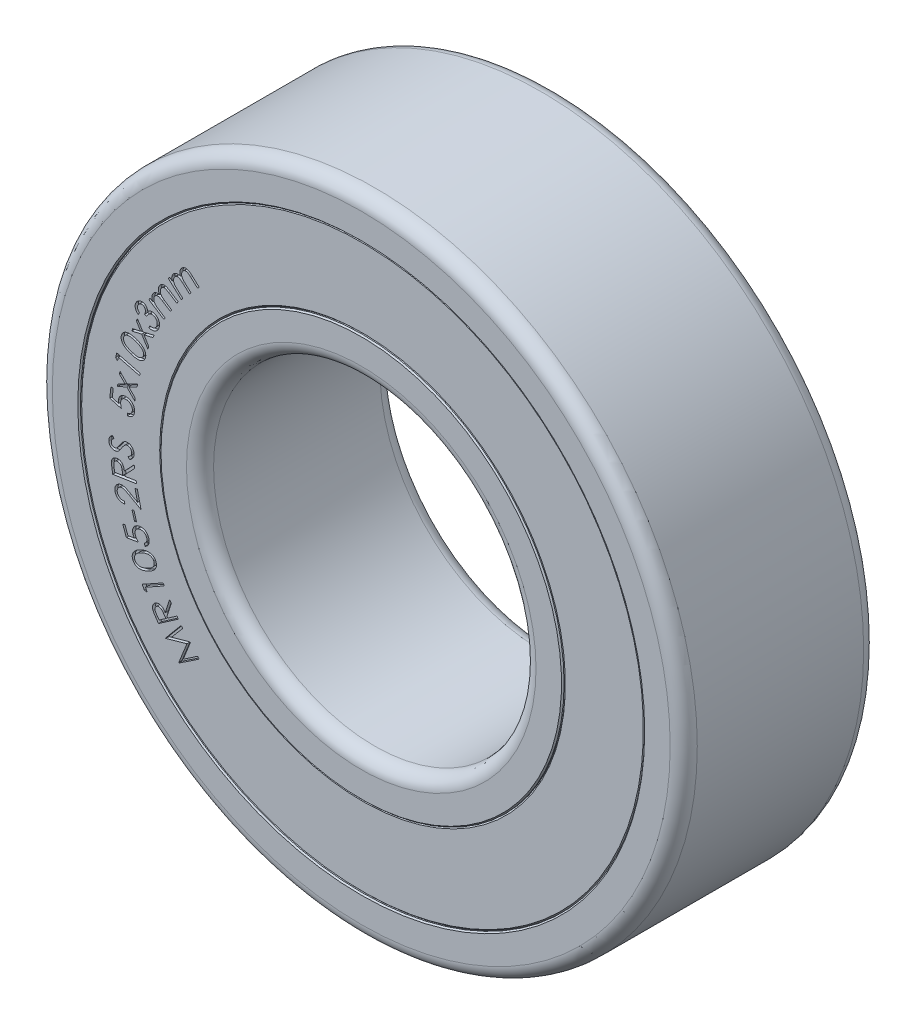
from build123d import *

# Parameters (mm, degrees)
SKETCH_R_INNER_BODY_W          = 3
SKETCH_R_INNER_BODY_H          = 0.625
FILLET_INNER_BODY_R            = 0.21
CHAMFER_INNER_BODY_SIZE        = 0.02
SKETCH_R_OUTER_BODY_W          = 3
SKETCH_R_OUTER_BODY_H          = 0.625
FILLET_OUTER_BODY_R            = 0.21
CHAMFER_OUTER_BODY_SIZE        = 0.02
SKETCH_R_SEAL_FACES_W          = 2.96
SKETCH_R_SEAL_FACES_H          = 1.25
CHAMFER_SEALS_SIZE             = 0.02
CUT_EXTRUDE_SEAL_LABEL_1_DEPTH = 0.05
CUT_EXTRUDE_SEAL_LABEL_2_DEPTH = 0.05


with BuildPart() as part:
    # Sketch R, INNER BODY → Revolve INNER BODY (revolve)
    with BuildSketch(Plane(origin=(0, 0, 0), x_dir=(0, 0, -1), z_dir=(1, 0, 0))):
        with Locations((0, 2.8125)):
            Rectangle(SKETCH_R_INNER_BODY_W, SKETCH_R_INNER_BODY_H)
    revolve(axis=Axis((0, 0, 17.5), (0, 0, -1)))

    # Fillet INNER BODY
    fillet_inner_body_edges = [part.edges().sort_by_distance(p)[0] for p in [
        (0, -2.5, 1.5),
        (0, -2.5, -1.5),
    ]]
    fillet(fillet_inner_body_edges, radius=FILLET_INNER_BODY_R)

    # Chamfer INNER BODY
    chamfer_inner_body_edges = [part.edges().sort_by_distance(p)[0] for p in [
        (0, -3.125, -1.5),
        (0, -3.125, 1.5),
    ]]
    chamfer(chamfer_inner_body_edges, length=CHAMFER_INNER_BODY_SIZE)


with BuildPart() as body_2:
    # Sketch R, OUTER BODY → Revolve OUTER BODY (revolve)
    with BuildSketch(Plane(origin=(0, 0, 0), x_dir=(0, 0, -1), z_dir=(1, 0, 0))):
        with Locations((0, 4.6875)):
            Rectangle(SKETCH_R_OUTER_BODY_W, SKETCH_R_OUTER_BODY_H)
    revolve(axis=Axis((0, 0, 17.5), (0, 0, -1)))

    # Fillet OUTER BODY
    fillet_outer_body_edges = [body_2.edges().sort_by_distance(p)[0] for p in [
        (0, -5, -1.5),
        (0, -5, 1.5),
    ]]
    fillet(fillet_outer_body_edges, radius=FILLET_OUTER_BODY_R)

    # Chamfer OUTER BODY
    chamfer_outer_body_edges = [body_2.edges().sort_by_distance(p)[0] for p in [
        (0, -4.375, 1.5),
        (0, -4.375, -1.5),
    ]]
    chamfer(chamfer_outer_body_edges, length=CHAMFER_OUTER_BODY_SIZE)


with BuildPart() as body_3:
    # Sketch R, SEAL FACES → Revolve SEALS (revolve)
    with BuildSketch(Plane(origin=(0, 0, 0), x_dir=(0, 0, -1), z_dir=(1, 0, 0))):
        with Locations((0, 3.75)):
            Rectangle(SKETCH_R_SEAL_FACES_W, SKETCH_R_SEAL_FACES_H)
    revolve(axis=Axis((0, 0, 17.5), (0, 0, -1)))

    # Chamfer SEALS
    chamfer_seals_edges = [body_3.edges().sort_by_distance(p)[0] for p in [
        (0, -3.125, -1.48),
        (0, -4.375, -1.48),
        (0, -4.375, 1.48),
        (0, -3.125, 1.48),
    ]]
    chamfer(chamfer_seals_edges, length=CHAMFER_SEALS_SIZE)

    # Sketch TEXT RADIUS 1 — MANUALLY ASSIGN TEXT AND FONT SIZE (FROM EQUATIONS) → Cut-Extrude SEAL LABEL 1 (cut)
    # profile 1 of 17: a face of its own
    with BuildSketch(Plane.XY.offset(1.48)):
        with BuildLine():
            Line((-3.012714423, 2.370990838), (-2.989201803, 2.397057545))
            Line((-2.989201803, 2.397057545), (-2.953895313, 2.365281703))
            add(Edge.make_bspline(
                [(-2.953895313, 2.365281703), (-2.95496403, 2.37029952), (-2.95701439, 2.379926322), (-2.958499377, 2.394010337), (-2.958731666, 2.407018608), (-2.957645417, 2.415218144), (-2.957125481, 2.419142881)],
                knots=[0, 0, 0, 0, 1.133186714, 2.174045632, 3.126000292, 4, 4, 4, 4], degree=3))
            add(Edge.make_bspline(
                [(-2.957125481, 2.419142881), (-2.955982834, 2.424115992), (-2.953731786, 2.433913165), (-2.948064686, 2.447768052), (-2.940695202, 2.460562585), (-2.934475169, 2.468100935), (-2.931359255, 2.471877256)],
                knots=[0, 0, 0, 0, 1.029547114, 2.028237688, 3.012249474, 4, 4, 4, 4], degree=3))
            add(Edge.make_bspline(
                [(-2.931359255, 2.471877256), (-2.92910506, 2.474257885), (-2.924622439, 2.47899193), (-2.917060805, 2.485134475), (-2.908957923, 2.49045433), (-2.900367421, 2.494815064), (-2.891559675, 2.498379292), (-2.882679404, 2.500829005), (-2.873906099, 2.502416177), (-2.865038631, 2.502795038), (-2.855820863, 2.501958393), (-2.845909479, 2.500078202), (-2.83526551, 2.496760383), (-2.828024871, 2.493887598), (-2.824237861, 2.492385069)],
                knots=[0, 0, 0, 0, 1.00341709, 1.995364157, 2.976127026, 3.967540135, 4.941802632, 5.881638814, 6.784534038, 7.667464209, 8.591103543, 9.614060977, 10.752102308, 12, 12, 12, 12], degree=3))
            add(Edge.make_bspline(
                [(-2.824237861, 2.492385069), (-2.826022701, 2.49805926), (-2.829501156, 2.509117628), (-2.832394806, 2.52592731), (-2.833000201, 2.542267672), (-2.83154623, 2.558047562), (-2.827903268, 2.573051206), (-2.822413703, 2.587121887), (-2.815008974, 2.600203303), (-2.808658268, 2.60788157), (-2.805457813, 2.611751054)],
                knots=[0, 0, 0, 0, 1.123244117, 2.189078194, 3.211940438, 4.20549438, 5.174215244, 6.119773289, 7.052454642, 8, 8, 8, 8], degree=3))
            add(Edge.make_bspline(
                [(-2.805457813, 2.611751054), (-2.802216553, 2.61507948), (-2.795871784, 2.621594875), (-2.784995431, 2.629544605), (-2.773369871, 2.635640192), (-2.761079644, 2.639846673), (-2.748348017, 2.642216557), (-2.735361908, 2.6425176), (-2.722283271, 2.640711389), (-2.711377214, 2.637624077), (-2.70244022, 2.634071506), (-2.695322506, 2.630483902), (-2.687782237, 2.626199707), (-2.679920019, 2.621054515), (-2.671656185, 2.615184348), (-2.663001802, 2.608557155), (-2.653982196, 2.601114327), (-2.64796279, 2.595746235), (-2.644850841, 2.592971006)],
                knots=[0, 0, 0, 0, 1.210155536, 2.368880225, 3.496539753, 4.622230428, 5.744448294, 6.861618091, 7.995013117, 9.175674556, 9.808779631, 10.501043236, 11.252832017, 12.069880044, 12.950622641, 13.896409227, 14.912472951, 16, 16, 16, 16], degree=3))
            Line((-2.644850841, 2.592971006), (-2.533297356, 2.492535309))
            Line((-2.533297356, 2.492535309), (-2.557486058, 2.4657174))
            Line((-2.557486058, 2.4657174), (-2.669039543, 2.566153097))
            add(Edge.make_bspline(
                [(-2.669039543, 2.566153097), (-2.671684659, 2.56851707), (-2.676753812, 2.573047437), (-2.684186546, 2.579399201), (-2.69118715, 2.584906254), (-2.69755321, 2.589861309), (-2.703478738, 2.593985264), (-2.708914567, 2.597403464), (-2.713820491, 2.600112809), (-2.71963094, 2.60275269), (-2.726696541, 2.60480834), (-2.735281763, 2.605977382), (-2.744037305, 2.605748597), (-2.752843809, 2.604053063), (-2.761502264, 2.601068916), (-2.769791438, 2.596609859), (-2.777696914, 2.590820876), (-2.782291255, 2.585987052), (-2.784649519, 2.583505862)],
                knots=[0, 0, 0, 0, 1.26477413, 2.423839134, 3.484830568, 4.440087929, 5.299425496, 6.057400986, 6.728549644, 7.295974469, 8.329763783, 9.338542923, 10.374450068, 11.43724272, 12.52420632, 13.626459509, 14.78166761, 16, 16, 16, 16], degree=3))
            add(Edge.make_bspline(
                [(-2.784649519, 2.583505862), (-2.787345716, 2.580258119), (-2.792688488, 2.573822405), (-2.798619005, 2.562737535), (-2.802785894, 2.550875117), (-2.805179255, 2.538341943), (-2.805699058, 2.525507751), (-2.804334582, 2.5126968), (-2.80104209, 2.500131963), (-2.796768986, 2.489812754), (-2.792091398, 2.481486153), (-2.787547299, 2.474705588), (-2.781929461, 2.467515316), (-2.775376376, 2.459784073), (-2.767894991, 2.451531209), (-2.759333694, 2.442905086), (-2.749872, 2.433705228), (-2.743101402, 2.427536768), (-2.739577404, 2.424326174)],
                knots=[0, 0, 0, 0, 1.079158303, 2.138455934, 3.199597358, 4.290419296, 5.394739698, 6.478654457, 7.578718267, 8.711733785, 9.329223882, 10.023129201, 10.80071397, 11.665642724, 12.619324365, 13.653617978, 14.77874214, 16, 16, 16, 16], degree=3))
            Line((-2.739577404, 2.424326174), (-2.659574399, 2.35228591))
            Line((-2.659574399, 2.35228591), (-2.683087019, 2.326144083))
            Line((-2.683087019, 2.326144083), (-2.787729447, 2.420344804))
            add(Edge.make_bspline(
                [(-2.787729447, 2.420344804), (-2.790700471, 2.422984081), (-2.796406667, 2.428053119), (-2.804725287, 2.4351599), (-2.812385985, 2.441539562), (-2.81951338, 2.446976106), (-2.82597181, 2.451719119), (-2.831910671, 2.45550465), (-2.837148565, 2.458658893), (-2.843290374, 2.461645856), (-2.850709443, 2.4641243), (-2.859679631, 2.465656814), (-2.868791246, 2.465744174), (-2.877888013, 2.464280478), (-2.886782608, 2.46144595), (-2.895246392, 2.457068297), (-2.903194289, 2.451246734), (-2.907861778, 2.446458276), (-2.910250481, 2.444007665)],
                knots=[0, 0, 0, 0, 1.3316686, 2.5576244, 3.666387285, 4.671704295, 5.561314417, 6.350341327, 7.031051914, 7.609000094, 8.635902035, 9.640167935, 10.647129479, 11.674888129, 12.715108216, 13.762142413, 14.854720911, 16, 16, 16, 16], degree=3))
            add(Edge.make_bspline(
                [(-2.910250481, 2.444007665), (-2.912844973, 2.440883176), (-2.917993563, 2.434682843), (-2.923693125, 2.423908189), (-2.927865351, 2.412331115), (-2.930319053, 2.39997345), (-2.930969474, 2.387254691), (-2.929906267, 2.37450082), (-2.926667223, 2.361972271), (-2.922674722, 2.351640701), (-2.918182455, 2.343399943), (-2.913910809, 2.33688094), (-2.908973008, 2.329928696), (-2.903071306, 2.32275341), (-2.896377083, 2.315239021), (-2.888847689, 2.307433039), (-2.880484142, 2.299313547), (-2.874557277, 2.293877588), (-2.871488462, 2.291062953)],
                knots=[0, 0, 0, 0, 1.091790377, 2.1665827, 3.263551854, 4.398859563, 5.547461796, 6.685472837, 7.832587872, 9.022842132, 9.659856588, 10.357938377, 11.121874393, 11.956436551, 12.859657689, 13.833103123, 14.878022624, 16, 16, 16, 16], degree=3))
            Line((-2.871488462, 2.291062953), (-2.78487488, 2.213088194))
            Line((-2.78487488, 2.213088194), (-2.8083875, 2.187021487))
            Line((-2.8083875, 2.187021487), (-3.012714423, 2.370990838))
        make_face()
    # profile 2 of 17: a face of its own
    with BuildSketch(Plane.XY.offset(1.48)):
        with BuildLine():
            Line((-3.312846695, 1.93387231), (-3.293991527, 1.963544786))
            Line((-3.293991527, 1.963544786), (-3.253802224, 1.9379288))
            add(Edge.make_bspline(
                [(-3.253802224, 1.9379288), (-3.255663966, 1.942708109), (-3.259244697, 1.951900258), (-3.263056123, 1.965575832), (-3.265509733, 1.978429621), (-3.265771138, 1.986747114), (-3.265896575, 1.990738295)],
                knots=[0, 0, 0, 0, 1.128486213, 2.17044239, 3.122079714, 4, 4, 4, 4], degree=3))
            add(Edge.make_bspline(
                [(-3.265896575, 1.990738295), (-3.265587219, 1.995839847), (-3.264977712, 2.005891143), (-3.261630417, 2.020487704), (-3.256580886, 2.034374126), (-3.251678772, 2.042834667), (-3.249219892, 2.04707844)],
                knots=[0, 0, 0, 0, 1.030120955, 2.029588836, 3.011650016, 4, 4, 4, 4], degree=3))
            add(Edge.make_bspline(
                [(-3.249219892, 2.04707844), (-3.247379684, 2.049806294), (-3.24372184, 2.055228542), (-3.23714613, 2.062467249), (-3.230118418, 2.069191928), (-3.222284919, 2.074873765), (-3.214180754, 2.079852726), (-3.205811533, 2.083774825), (-3.19735007, 2.086663533), (-3.188630991, 2.088537788), (-3.179368357, 2.089259873), (-3.169280732, 2.08888834), (-3.158212797, 2.087545771), (-3.150599159, 2.085835877), (-3.146605709, 2.084939017)],
                knots=[0, 0, 0, 0, 1.003922736, 1.995530533, 2.980477705, 3.970313718, 4.945019562, 5.882641833, 6.787329118, 7.670978471, 8.599697079, 9.617511595, 10.750354512, 12, 12, 12, 12], degree=3))
            add(Edge.make_bspline(
                [(-3.146605709, 2.084939017), (-3.14934289, 2.090262906), (-3.154664319, 2.100613226), (-3.160255645, 2.116783004), (-3.163616603, 2.132816269), (-3.1647712, 2.148661335), (-3.163748558, 2.164122119), (-3.160524371, 2.178936224), (-3.155483641, 2.193167782), (-3.150430373, 2.201820641), (-3.147882753, 2.206183007)],
                knots=[0, 0, 0, 0, 1.126104545, 2.189290601, 3.210180596, 4.202861159, 5.171695231, 6.116822106, 7.050590007, 8, 8, 8, 8], degree=3))
            add(Edge.make_bspline(
                [(-3.147882753, 2.206183007), (-3.145238097, 2.210026388), (-3.140069841, 2.217537228), (-3.130578907, 2.227152435), (-3.120145432, 2.235162282), (-3.108644983, 2.241346667), (-3.096379383, 2.245690114), (-3.083572947, 2.248241148), (-3.070319098, 2.248632647), (-3.059020842, 2.247367073), (-3.049631716, 2.245285202), (-3.041981623, 2.242986377), (-3.033824691, 2.239986776), (-3.025198537, 2.236194896), (-3.016091096, 2.231732332), (-3.006458821, 2.22661709), (-2.99631272, 2.220751229), (-2.989465403, 2.216447156), (-2.985923618, 2.214220867)],
                knots=[0, 0, 0, 0, 1.211438798, 2.367426385, 3.496761733, 4.621562221, 5.748340721, 6.869780038, 8.003669515, 9.183176048, 9.816822021, 10.503012172, 11.259190948, 12.075883802, 12.952615063, 13.896579827, 14.912002779, 16, 16, 16, 16], degree=3))
            Line((-2.985923618, 2.214220867), (-2.859045613, 2.133391541))
            Line((-2.859045613, 2.133391541), (-2.878501743, 2.102817622))
            Line((-2.878501743, 2.102817622), (-3.005379748, 2.183646949))
            add(Edge.make_bspline(
                [(-3.005379748, 2.183646949), (-3.008378234, 2.185534921), (-3.014142141, 2.189164116), (-3.022530017, 2.194223182), (-3.030355159, 2.198542155), (-3.037488418, 2.202389282), (-3.044077061, 2.205394447), (-3.049965581, 2.207982118), (-3.055281943, 2.209766367), (-3.061459441, 2.211392237), (-3.068799552, 2.212360095), (-3.077494056, 2.212025988), (-3.086129306, 2.210384865), (-3.094533239, 2.207240461), (-3.102637182, 2.202928881), (-3.110027329, 2.197074449), (-3.116917193, 2.190081208), (-3.120649287, 2.184540994), (-3.122567248, 2.181693824)],
                knots=[0, 0, 0, 0, 1.260250063, 2.422544177, 3.483039069, 4.439111802, 5.303703667, 6.057963327, 6.725419382, 7.295665574, 8.328502146, 9.344382339, 10.378370132, 11.440546422, 12.524453312, 13.628909857, 14.781473476, 16, 16, 16, 16], degree=3))
            add(Edge.make_bspline(
                [(-3.122567248, 2.181693824), (-3.124703382, 2.178025768), (-3.128924667, 2.170777204), (-3.13290977, 2.158831342), (-3.135258091, 2.146444316), (-3.135478764, 2.133643716), (-3.133948617, 2.120831217), (-3.130439016, 2.108377746), (-3.125088185, 2.096489736), (-3.119207326, 2.086950428), (-3.11312484, 2.079555983), (-3.107505185, 2.073584322), (-3.10083891, 2.067305894), (-3.093026498, 2.060794132), (-3.084276309, 2.053871876), (-3.074356614, 2.046747119), (-3.063434939, 2.039260176), (-3.055722198, 2.034265043), (-3.051728906, 2.0316788)],
                knots=[0, 0, 0, 0, 1.081380584, 2.136950852, 3.196715391, 4.290427083, 5.392054001, 6.481176659, 7.580332704, 8.712237078, 9.330397004, 10.02254055, 10.805069428, 11.667176105, 12.618885228, 13.653604506, 14.785147607, 16, 16, 16, 16], degree=3))
            Line((-3.051728906, 2.0316788), (-2.960758353, 1.973761132))
            Line((-2.960758353, 1.973761132), (-2.979613522, 1.944088656))
            Line((-2.979613522, 1.944088656), (-3.098603906, 2.01988493))
            add(Edge.make_bspline(
                [(-3.098603906, 2.01988493), (-3.101974511, 2.02202911), (-3.108425064, 2.026132571), (-3.11785024, 2.031780741), (-3.12651172, 2.036723627), (-3.134443792, 2.040974878), (-3.141635758, 2.044507719), (-3.148096557, 2.047374893), (-3.153788695, 2.049613721), (-3.160376348, 2.051518889), (-3.168137138, 2.052708978), (-3.177259876, 2.052729888), (-3.18627527, 2.051285265), (-3.1950238, 2.04831779), (-3.203408068, 2.044092607), (-3.210975096, 2.038297184), (-3.217971991, 2.031350412), (-3.221738988, 2.025815426), (-3.223679027, 2.022964858)],
                knots=[0, 0, 0, 0, 1.335253476, 2.555364331, 3.672423472, 4.668440551, 5.56307976, 6.350027616, 7.030875968, 7.605723621, 8.639159506, 9.643546476, 10.643914833, 11.676163738, 12.720557166, 13.766793592, 14.84987824, 16, 16, 16, 16], degree=3))
            add(Edge.make_bspline(
                [(-3.223679027, 2.022964858), (-3.225701835, 2.019466541), (-3.229746398, 2.012471728), (-3.233671503, 2.000909419), (-3.235885117, 1.988732476), (-3.236201383, 1.976104302), (-3.234846988, 1.963385277), (-3.231443655, 1.951010286), (-3.226371835, 1.93907679), (-3.220581834, 1.929581249), (-3.214821115, 1.922156752), (-3.209606113, 1.916351621), (-3.203469148, 1.910424547), (-3.196493572, 1.904292418), (-3.188658756, 1.897963663), (-3.179902874, 1.891523477), (-3.170320671, 1.884842029), (-3.163546821, 1.880465882), (-3.160052224, 1.878208247)],
                knots=[0, 0, 0, 0, 1.084303331, 2.168042208, 3.262766472, 4.401029161, 5.552652315, 6.689301196, 7.838501349, 9.028907117, 9.667202196, 10.363274988, 11.125011402, 11.959739667, 12.85976013, 13.831924419, 14.88149976, 16, 16, 16, 16], degree=3))
            Line((-3.160052224, 1.878208247), (-3.061569652, 1.815482887))
            Line((-3.061569652, 1.815482887), (-3.08042482, 1.785810411))
            Line((-3.08042482, 1.785810411), (-3.312846695, 1.93387231))
        make_face()
    # profile 3 of 17: a face of its own
    with BuildSketch(Plane.XY.offset(1.48)):
        with BuildLine():
            Line((-3.459645479, 1.685527769), (-3.476547522, 1.651423202))
            add(Edge.make_bspline(
                [(-3.476547522, 1.651423202), (-3.479515807, 1.653909458), (-3.48532223, 1.658772961), (-3.493212035, 1.666650067), (-3.500322807, 1.674661618), (-3.506508319, 1.683008245), (-3.511939243, 1.691502739), (-3.516409032, 1.700322198), (-3.520015755, 1.709350782), (-3.522810289, 1.718570632), (-3.524673756, 1.727908613), (-3.525729982, 1.737231654), (-3.525986259, 1.746536736), (-3.525280167, 1.755788404), (-3.523782859, 1.764991697), (-3.521408229, 1.77412756), (-3.51830314, 1.783261929), (-3.515518665, 1.789143039), (-3.514107619, 1.792123322)],
                knots=[0, 0, 0, 0, 1.171772058, 2.292167472, 3.371915871, 4.412054008, 5.434244889, 6.420872594, 7.400690346, 8.374447615, 9.333425574, 10.279460697, 11.212219407, 12.1471937, 13.08443966, 14.031385629, 15.002394462, 16, 16, 16, 16], degree=3))
            add(Edge.make_bspline(
                [(-3.514107619, 1.792123322), (-3.511839622, 1.796374159), (-3.507361823, 1.804766762), (-3.498756652, 1.81607019), (-3.489125332, 1.82635865), (-3.478161548, 1.835181392), (-3.466507096, 1.842722739), (-3.454196169, 1.848390042), (-3.441533773, 1.852389373), (-3.428573952, 1.854441863), (-3.41567136, 1.854824393), (-3.403153429, 1.853591039), (-3.391134261, 1.850589588), (-3.383682688, 1.847273267), (-3.379942955, 1.845608899)],
                knots=[0, 0, 0, 0, 1.081038254, 2.134338885, 3.181081809, 4.240869698, 5.288217344, 6.29267059, 7.276809815, 8.262877276, 9.231060111, 10.169959636, 11.081554542, 12, 12, 12, 12], degree=3))
            add(Edge.make_bspline(
                [(-3.379942955, 1.845608899), (-3.376471847, 1.843759112), (-3.369656941, 1.840127385), (-3.360693601, 1.832983023), (-3.35280528, 1.824968374), (-3.346252056, 1.815768094), (-3.340863188, 1.805545012), (-3.33683747, 1.794204319), (-3.333937585, 1.781856514), (-3.333115258, 1.773208446), (-3.332692354, 1.768760942)],
                knots=[0, 0, 0, 0, 0.993660863, 1.950876728, 2.887625796, 3.832168341, 4.798904821, 5.803361309, 6.870318926, 8, 8, 8, 8], degree=3))
            add(Edge.make_bspline(
                [(-3.332692354, 1.768760942), (-3.329036132, 1.771818447), (-3.321866343, 1.777814163), (-3.309937229, 1.784957928), (-3.297515077, 1.790676923), (-3.288763554, 1.793043843), (-3.28439007, 1.794226687)],
                knots=[0, 0, 0, 0, 1.035504356, 2.030606204, 3.015815541, 4, 4, 4, 4], degree=3))
            add(Edge.make_bspline(
                [(-3.28439007, 1.794226687), (-3.281294609, 1.794885017), (-3.275216544, 1.796177675), (-3.266033362, 1.797111288), (-3.257013258, 1.797381909), (-3.248114073, 1.796756622), (-3.239346491, 1.795391518), (-3.230707419, 1.793316539), (-3.22222105, 1.790352326), (-3.216762749, 1.787836631), (-3.21400245, 1.786564428)],
                knots=[0, 0, 0, 0, 1.050339516, 2.062384144, 3.060633537, 4.044191472, 5.020409319, 6.004705278, 6.990966602, 8, 8, 8, 8], degree=3))
            add(Edge.make_bspline(
                [(-3.21400245, 1.786564428), (-3.209391275, 1.784060304), (-3.200178253, 1.779057123), (-3.187757059, 1.76929014), (-3.176574406, 1.757878149), (-3.168462237, 1.747059045), (-3.162744225, 1.737754101), (-3.158832306, 1.730598775), (-3.155659848, 1.723193207), (-3.152822305, 1.715702466), (-3.15065637, 1.707979144), (-3.149013246, 1.70012198), (-3.147874829, 1.692092266), (-3.147077356, 1.681236073), (-3.147479211, 1.667500171), (-3.150061276, 1.651069746), (-3.154798361, 1.634698655), (-3.159533084, 1.624228101), (-3.161944157, 1.618896158)],
                knots=[0, 0, 0, 0, 1.285874205, 2.569146777, 3.859755077, 5.198165949, 5.876917388, 6.539509113, 7.197152531, 7.852379827, 8.504024093, 9.163273341, 9.821146404, 10.492766875, 11.832911815, 13.182673212, 14.56532674, 16, 16, 16, 16], degree=3))
            add(Edge.make_bspline(
                [(-3.161944157, 1.618896158), (-3.163773281, 1.615413328), (-3.167372711, 1.608559662), (-3.173519577, 1.59891815), (-3.180324085, 1.590180035), (-3.187624374, 1.582221576), (-3.195545248, 1.575154896), (-3.203998973, 1.568861612), (-3.21304684, 1.56345476), (-3.222596835, 1.558870738), (-3.232609485, 1.555131828), (-3.243131346, 1.552558109), (-3.254005842, 1.550786299), (-3.265327837, 1.550151327), (-3.277035422, 1.550459171), (-3.289184601, 1.551777343), (-3.30174457, 1.554006727), (-3.310145453, 1.556234414), (-3.314438147, 1.557372721)],
                knots=[0, 0, 0, 0, 1.044443712, 2.055302397, 3.031625024, 3.982199091, 4.91935063, 5.846349474, 6.776942873, 7.713834856, 8.656373653, 9.609549237, 10.585826571, 11.578454183, 12.616165576, 13.692736826, 14.821031549, 16, 16, 16, 16], degree=3))
            Line((-3.314438147, 1.557372721), (-3.298212186, 1.590200245))
            add(Edge.make_bspline(
                [(-3.298212186, 1.590200245), (-3.29521146, 1.589649217), (-3.289402935, 1.588582589), (-3.280859934, 1.587439258), (-3.272757161, 1.586781094), (-3.265105639, 1.586854772), (-3.257891085, 1.587134552), (-3.251133284, 1.588138031), (-3.244791406, 1.589606883), (-3.240809447, 1.591015562), (-3.238867234, 1.591702649)],
                knots=[0, 0, 0, 0, 1.217105065, 2.355958716, 3.437911891, 4.456964627, 5.407396028, 6.315891952, 7.178571371, 8, 8, 8, 8], degree=3))
            add(Edge.make_bspline(
                [(-3.238867234, 1.591702649), (-3.236511754, 1.592726379), (-3.231826174, 1.594762809), (-3.22528064, 1.598757141), (-3.219089162, 1.60326962), (-3.213268356, 1.608413459), (-3.207835344, 1.614205107), (-3.202908104, 1.620720976), (-3.198274355, 1.627768367), (-3.195653421, 1.632842802), (-3.19432096, 1.635422601)],
                knots=[0, 0, 0, 0, 0.964421352, 1.918451672, 2.874847187, 3.841791586, 4.834060052, 5.854457643, 6.909224512, 8, 8, 8, 8], degree=3))
            add(Edge.make_bspline(
                [(-3.19432096, 1.635422601), (-3.192917037, 1.63843058), (-3.190176033, 1.644303328), (-3.187023509, 1.653284876), (-3.184735975, 1.662126497), (-3.183332211, 1.670881311), (-3.183011405, 1.679544245), (-3.183390677, 1.68808854), (-3.184892001, 1.69648363), (-3.187124433, 1.704707359), (-3.190101594, 1.71260312), (-3.1937188, 1.71998659), (-3.197874482, 1.726815894), (-3.202607288, 1.733080993), (-3.207995232, 1.738750726), (-3.213937288, 1.743851844), (-3.220427777, 1.748437779), (-3.225139689, 1.750908903), (-3.227524085, 1.75215938)],
                knots=[0, 0, 0, 0, 1.175409932, 2.294857924, 3.366320394, 4.407651425, 5.428760511, 6.432576231, 7.431559181, 8.442989289, 9.448019359, 10.416037763, 11.351689464, 12.276045156, 13.192191792, 14.116845396, 15.047056602, 16, 16, 16, 16], degree=3))
            add(Edge.make_bspline(
                [(-3.227524085, 1.75215938), (-3.230817497, 1.753613254), (-3.237371794, 1.756506643), (-3.247855271, 1.759032545), (-3.258682632, 1.760000311), (-3.26970302, 1.759466437), (-3.28062383, 1.757458659), (-3.291131268, 1.753973803), (-3.301057417, 1.748970753), (-3.308775414, 1.743520754), (-3.314816, 1.738350262), (-3.319335322, 1.733557673), (-3.324077516, 1.728170537), (-3.328909094, 1.722021904), (-3.333850207, 1.715131638), (-3.338838537, 1.707442983), (-3.344065668, 1.69911733), (-3.3474135, 1.693228564), (-3.349143676, 1.690185221)],
                knots=[0, 0, 0, 0, 1.126454359, 2.24178331, 3.360777988, 4.523495542, 5.688646891, 6.83017109, 7.981284599, 9.159052436, 9.782120359, 10.470281999, 11.221055649, 12.031167105, 12.919695484, 13.877371002, 14.903015015, 16, 16, 16, 16], degree=3))
            Line((-3.349143676, 1.690185221), (-3.379942955, 1.7053595))
            add(Edge.make_bspline(
                [(-3.379942955, 1.7053595), (-3.378151629, 1.709155055), (-3.374638177, 1.716599544), (-3.370965831, 1.728180223), (-3.368273439, 1.739674503), (-3.367191323, 1.751053945), (-3.366986105, 1.761910213), (-3.368200818, 1.771906415), (-3.370471856, 1.780926065), (-3.374057542, 1.788882975), (-3.378611165, 1.795893344), (-3.384058149, 1.801920056), (-3.390289311, 1.807091813), (-3.394994533, 1.809674261), (-3.39737084, 1.81097849)],
                knots=[0, 0, 0, 0, 1.26729371, 2.485631784, 3.664561431, 4.828944134, 5.934054197, 6.940484307, 7.863941801, 8.73468092, 9.566039064, 10.380690383, 11.182190153, 12, 12, 12, 12], degree=3))
            add(Edge.make_bspline(
                [(-3.39737084, 1.81097849), (-3.399180082, 1.811827728), (-3.402770005, 1.813512798), (-3.408423449, 1.81517244), (-3.414121964, 1.816369102), (-3.419926074, 1.816782054), (-3.425813017, 1.816631921), (-3.431784534, 1.815884963), (-3.437826033, 1.814438845), (-3.443838449, 1.812319787), (-3.44978896, 1.809740731), (-3.455385005, 1.806477289), (-3.460725478, 1.802806743), (-3.465600053, 1.798460058), (-3.470204993, 1.793661554), (-3.474411209, 1.788291532), (-3.478275783, 1.782419386), (-3.480465691, 1.778197147), (-3.481580575, 1.776047601)],
                knots=[0, 0, 0, 0, 0.944034095, 1.873165196, 2.779056696, 3.693808924, 4.617944254, 5.561086347, 6.534962474, 7.550028172, 8.573420706, 9.597361389, 10.60938216, 11.633322843, 12.680495534, 13.751509787, 14.85529142, 16, 16, 16, 16], degree=3))
            add(Edge.make_bspline(
                [(-3.481580575, 1.776047601), (-3.483146103, 1.772483319), (-3.48620372, 1.765521953), (-3.488809862, 1.754524228), (-3.489396982, 1.743494138), (-3.488351275, 1.73432113), (-3.486446014, 1.727013396), (-3.484386277, 1.721404201), (-3.48184976, 1.715640958), (-3.478553649, 1.709857905), (-3.474713752, 1.703916397), (-3.470283079, 1.69784057), (-3.465222261, 1.691664248), (-3.461542125, 1.687614767), (-3.459645479, 1.685527769)],
                knots=[0, 0, 0, 0, 1.396735433, 2.727950883, 4.034523713, 5.348048009, 6.02672287, 6.743904628, 7.492996193, 8.286482796, 9.132503293, 10.034107102, 10.986829863, 12, 12, 12, 12], degree=3))
        make_face()
    # profile 4 of 17: a face of its own
    with BuildSketch(Plane.XY.offset(1.48)):
        Polygon((-3.579588843, 1.380450271), (-3.563062401, 1.419512771), (-3.441142329, 1.446856521), (-3.506496896, 1.553376953), (-3.490045574, 1.592439453), (-3.4064368, 1.455269982), (-3.232533555, 1.496510968), (-3.249285357, 1.456997747), (-3.388182593, 1.424545824), (-3.314189204, 1.303376953), (-3.330565406, 1.264539814), (-3.422888122, 1.416432843), align=None)
    # profile 5 of 17: a face of its own
    with BuildSketch(Plane.XY.offset(1.48)):
        with BuildLine():
            add(Edge.make_bspline(
                [(-3.59207488, 1.068060259), (-3.597699877, 1.069994619), (-3.608641719, 1.073757371), (-3.624315737, 1.079962912), (-3.638887725, 1.086160461), (-3.652350166, 1.09246692), (-3.664619398, 1.098985045), (-3.675795659, 1.105561486), (-3.68576395, 1.112361663), (-3.694682621, 1.119275824), (-3.702637459, 1.126432231), (-3.709856118, 1.133689562), (-3.71633509, 1.141159893), (-3.722158447, 1.148768093), (-3.727301776, 1.156577124), (-3.731638276, 1.164646001), (-3.735362746, 1.172834021), (-3.738284678, 1.181216602), (-3.740534503, 1.189682384), (-3.742113948, 1.198195219), (-3.743054366, 1.206708469), (-3.743155522, 1.215201762), (-3.742722768, 1.223688834), (-3.741617591, 1.232165178), (-3.73969461, 1.240637043), (-3.737993414, 1.24620522), (-3.737131972, 1.249024802)],
                knots=[0, 0, 0, 0, 1.641440979, 3.192959937, 4.65117722, 6.01136881, 7.294317887, 8.484238473, 9.58830348, 10.622321069, 11.596235571, 12.539358748, 13.445605834, 14.323288378, 15.181993246, 16.023081927, 16.848957824, 17.662012402, 18.469970148, 19.264246598, 20.049543443, 20.830571676, 21.605676782, 22.393432761, 23.186475652, 24, 24, 24, 24], degree=3))
            add(Edge.make_bspline(
                [(-3.737131972, 1.249024802), (-3.736126501, 1.251822891), (-3.734128096, 1.257384187), (-3.730339616, 1.26533053), (-3.726032181, 1.272877626), (-3.721244416, 1.280056174), (-3.715780156, 1.286738348), (-3.709862405, 1.293073996), (-3.703346732, 1.298934371), (-3.696387287, 1.304443835), (-3.688837211, 1.309398486), (-3.680793577, 1.313859225), (-3.672196608, 1.317653366), (-3.66317561, 1.320981584), (-3.653658742, 1.323693159), (-3.643634576, 1.325764707), (-3.63312945, 1.327350323), (-3.622093335, 1.328325619), (-3.610475203, 1.328649937), (-3.598184557, 1.328063906), (-3.585222879, 1.32678152), (-3.571581721, 1.324740596), (-3.55729575, 1.321866806), (-3.542353489, 1.31813825), (-3.526700331, 1.313738849), (-3.516140131, 1.310240522), (-3.510719712, 1.308444874)],
                knots=[0, 0, 0, 0, 0.814640173, 1.619124409, 2.409218742, 3.195487221, 3.981276157, 4.772800419, 5.569752747, 6.381292718, 7.203732524, 8.042453107, 8.899703975, 9.777028479, 10.676521581, 11.609466733, 12.581200046, 13.58733231, 14.644769468, 15.7646588, 16.957878062, 18.214038094, 19.544056551, 20.950824233, 22.43489626, 24, 24, 24, 24], degree=3))
            add(Edge.make_bspline(
                [(-3.510719712, 1.308444874), (-3.505348034, 1.306578034), (-3.494867877, 1.302935825), (-3.479776469, 1.297011112), (-3.465733251, 1.290841747), (-3.452655265, 1.284563713), (-3.440660002, 1.277925349), (-3.42958041, 1.271208344), (-3.419549163, 1.264231063), (-3.410575724, 1.256955381), (-3.402408069, 1.249548924), (-3.394963989, 1.242011021), (-3.388341456, 1.234212932), (-3.38236924, 1.226344667), (-3.377166996, 1.218248298), (-3.372623156, 1.210021608), (-3.36894873, 1.201523923), (-3.365918079, 1.19292141), (-3.363727126, 1.18420368), (-3.362005138, 1.175539973), (-3.361097375, 1.166864749), (-3.36099846, 1.158200104), (-3.361392189, 1.149528782), (-3.362636836, 1.140894376), (-3.364491973, 1.132272147), (-3.366268347, 1.12664162), (-3.367165025, 1.123799441)],
                knots=[0, 0, 0, 0, 1.559466531, 3.042522884, 4.444692798, 5.765325, 7.01926836, 8.202890523, 9.317340213, 10.367277743, 11.368734953, 12.339928488, 13.270227594, 14.172556645, 15.046856847, 15.907293491, 16.746786398, 17.582902183, 18.405686104, 19.20971556, 20.00371196, 20.793540058, 21.584322847, 22.381638198, 23.183082911, 24, 24, 24, 24], degree=3))
            add(Edge.make_bspline(
                [(-3.367165025, 1.123799441), (-3.368179443, 1.121030242), (-3.370180686, 1.115567171), (-3.373809979, 1.107686367), (-3.378019311, 1.100258484), (-3.382758616, 1.093242211), (-3.388060867, 1.08668359), (-3.393860983, 1.08047851), (-3.400245659, 1.074736318), (-3.407085656, 1.069358103), (-3.414482632, 1.064546019), (-3.422348998, 1.060285815), (-3.430675187, 1.05655989), (-3.43950991, 1.053500164), (-3.448801812, 1.050974071), (-3.458551322, 1.048910652), (-3.468769096, 1.047512002), (-3.47950324, 1.046677617), (-3.490872746, 1.046509015), (-3.502985366, 1.047252209), (-3.515902543, 1.048668356), (-3.529612124, 1.050958965), (-3.544107724, 1.054081316), (-3.559426448, 1.057900868), (-3.575534471, 1.062574916), (-3.586452506, 1.066195695), (-3.59207488, 1.068060259)],
                knots=[0, 0, 0, 0, 0.814529537, 1.606902193, 2.393729369, 3.17079522, 3.943259445, 4.721402268, 5.514800962, 6.313250139, 7.122947728, 7.949433551, 8.782465271, 9.640094347, 10.529551969, 11.441274047, 12.391219926, 13.37647815, 14.414227385, 15.529718048, 16.72680231, 18.002815746, 19.367728099, 20.822373705, 22.363642724, 24, 24, 24, 24], degree=3))
        make_face()
        with BuildLine():
            add(Edge.make_bspline(
                [(-3.58005565, 1.101113143), (-3.575231965, 1.099507189), (-3.565897746, 1.096399538), (-3.552185593, 1.092347627), (-3.539285725, 1.088890185), (-3.527174938, 1.085990936), (-3.515847192, 1.083794449), (-3.505314811, 1.082298708), (-3.495590451, 1.08132774), (-3.486579635, 1.081125358), (-3.478123668, 1.081403739), (-3.470096851, 1.082240768), (-3.462417912, 1.083510012), (-3.455075366, 1.085224331), (-3.448100999, 1.087485795), (-3.441466981, 1.09018796), (-3.435206161, 1.093346738), (-3.427474147, 1.098122875), (-3.418797485, 1.10491156), (-3.410063883, 1.114233133), (-3.403049123, 1.124483044), (-3.400058022, 1.132044839), (-3.398565265, 1.135818672)],
                knots=[0, 0, 0, 0, 1.476754539, 2.857638699, 4.152712412, 5.35598101, 6.47440626, 7.503085215, 8.445464063, 9.31132826, 10.119250641, 10.901655495, 11.653823127, 12.378950589, 13.089744672, 13.781335256, 14.457960519, 15.12414432, 16.419218032, 17.644037341, 18.824219505, 20, 20, 20, 20], degree=3))
            add(Edge.make_bspline(
                [(-3.398565265, 1.135818672), (-3.397439326, 1.139746275), (-3.395196904, 1.147568494), (-3.394494186, 1.159908165), (-3.395717727, 1.172420118), (-3.398419569, 1.182868436), (-3.401578338, 1.191195833), (-3.404563591, 1.197422497), (-3.408234452, 1.203472288), (-3.412415858, 1.20938111), (-3.417213245, 1.21515598), (-3.422596022, 1.220742151), (-3.428583665, 1.226194697), (-3.432875056, 1.229617792), (-3.435073679, 1.231371557)],
                knots=[0, 0, 0, 0, 1.340059955, 2.668865427, 4.033890117, 5.461838858, 6.202006204, 6.960675499, 7.728892089, 8.526255308, 9.339114203, 10.195199423, 11.075340611, 12, 12, 12, 12], degree=3))
            add(Edge.make_bspline(
                [(-3.435073679, 1.231371557), (-3.437901733, 1.233537076), (-3.443658766, 1.237945394), (-3.452951163, 1.243971107), (-3.46279646, 1.249839165), (-3.473234114, 1.255481779), (-3.48430973, 1.260796076), (-3.495982218, 1.265913616), (-3.508272814, 1.270809845), (-3.516767131, 1.273747844), (-3.521086299, 1.275241749)],
                knots=[0, 0, 0, 0, 0.880977233, 1.793393766, 2.737950711, 3.716457469, 4.727831916, 5.776451838, 6.869376288, 8, 8, 8, 8], degree=3))
            add(Edge.make_bspline(
                [(-3.521086299, 1.275241749), (-3.525433771, 1.276674697), (-3.53391399, 1.279469817), (-3.5465046, 1.28305357), (-3.558588405, 1.286181187), (-3.570227601, 1.28863019), (-3.581366894, 1.290630737), (-3.59204719, 1.291997116), (-3.602253972, 1.292737508), (-3.611983185, 1.292991544), (-3.621209008, 1.292672017), (-3.629997116, 1.291967855), (-3.63828313, 1.290640034), (-3.646160153, 1.289093705), (-3.653465491, 1.286729677), (-3.660403821, 1.284192895), (-3.6668157, 1.280988477), (-3.674608072, 1.276254041), (-3.683217396, 1.269510173), (-3.691851203, 1.260290332), (-3.69877008, 1.250141096), (-3.701710091, 1.24263191), (-3.703177645, 1.238883576)],
                knots=[0, 0, 0, 0, 1.33002328, 2.594355308, 3.803221639, 4.956318928, 6.049696031, 7.091192469, 8.083434855, 9.022325745, 9.917778434, 10.764954712, 11.582036535, 12.355513222, 13.094295171, 13.810516886, 14.500381226, 15.172992341, 16.4582767, 17.662931246, 18.833413866, 20, 20, 20, 20], degree=3))
            add(Edge.make_bspline(
                [(-3.703177645, 1.238883576), (-3.704303911, 1.234955915), (-3.706560793, 1.227085422), (-3.707246201, 1.214668103), (-3.706021508, 1.202004392), (-3.703289818, 1.191416855), (-3.700018004, 1.183013241), (-3.697010869, 1.176740527), (-3.693382816, 1.170639113), (-3.689158211, 1.164708901), (-3.68438217, 1.158917621), (-3.679156742, 1.153180911), (-3.673242324, 1.147701224), (-3.666728772, 1.142324079), (-3.659425377, 1.136999106), (-3.651149398, 1.131750342), (-3.641791467, 1.126589704), (-3.631425264, 1.12143804), (-3.620070701, 1.116229127), (-3.607642123, 1.111158096), (-3.594215022, 1.106051967), (-3.584871633, 1.10279297), (-3.58005565, 1.101113143)],
                knots=[0, 0, 0, 0, 1.183595871, 2.371763565, 3.584648393, 4.868812758, 5.531957703, 6.202045516, 6.886812516, 7.591076389, 8.314640767, 9.066103998, 9.843072408, 10.654147884, 11.518238478, 12.466499531, 13.498549769, 14.620665228, 15.828086484, 17.126016731, 18.518626052, 20, 20, 20, 20], degree=3))
        make_face(mode=Mode.SUBTRACT)
    # profile 6 of 17: a face of its own
    with BuildSketch(Plane.XY.offset(1.48)):
        Polygon((-3.828808934, 0.900338125), (-3.810404487, 0.971552067), (-3.447799319, 0.877802067), (-3.457114223, 0.841819495), (-3.78418754, 0.926404832), (-3.798911098, 0.869463726), align=None)
    # profile 7 of 17: a face of its own
    with BuildSketch(Plane.XY.offset(1.48)):
        Polygon((-3.801074699, 0.522660293), (-3.793712921, 0.56450224), (-3.680807271, 0.618438538), (-3.768472536, 0.707831567), (-3.761110757, 0.749598394), (-3.648730949, 0.634288899), (-3.488274219, 0.713540701), (-3.495711118, 0.671248033), (-3.624091526, 0.608447552), (-3.524782632, 0.506734812), (-3.532069291, 0.465193346), (-3.656017608, 0.592747432), align=None)
    # profile 8 of 17: a face of its own
    with BuildSketch(Plane.XY.offset(1.48)):
        with BuildLine():
            Line((-3.901777856, 0.470355148), (-3.866621606, 0.466824499))
            Line((-3.866621606, 0.466824499), (-3.879993, 0.335213922))
            Line((-3.879993, 0.335213922), (-3.781134827, 0.306668249))
            add(Edge.make_bspline(
                [(-3.781134827, 0.306668249), (-3.78182762, 0.310666429), (-3.78317305, 0.318431047), (-3.784029142, 0.329838087), (-3.784509518, 0.340557025), (-3.783956546, 0.347434961), (-3.783688914, 0.350763802)],
                knots=[0, 0, 0, 0, 1.098292835, 2.132926456, 3.096358269, 4, 4, 4, 4], degree=3))
            add(Edge.make_bspline(
                [(-3.783688914, 0.350763802), (-3.783165591, 0.354883872), (-3.782139128, 0.362965127), (-3.779303952, 0.374652746), (-3.775592161, 0.385709002), (-3.770691414, 0.396020268), (-3.765053209, 0.405826831), (-3.758083638, 0.414744163), (-3.750349859, 0.423181003), (-3.741555755, 0.430767353), (-3.732105254, 0.437576985), (-3.722049456, 0.443358468), (-3.711455411, 0.447893528), (-3.700457238, 0.451608789), (-3.688888856, 0.453915169), (-3.676888118, 0.455389592), (-3.664380297, 0.455704073), (-3.65593097, 0.455009025), (-3.651627616, 0.454655028)],
                knots=[0, 0, 0, 0, 1.057617374, 2.074448882, 3.059180423, 4.02405095, 4.979422234, 5.935326097, 6.901567104, 7.892008715, 8.888944826, 9.866392949, 10.840837255, 11.821508371, 12.818914047, 13.840698724, 14.90023925, 16, 16, 16, 16], degree=3))
            add(Edge.make_bspline(
                [(-3.651627616, 0.454655028), (-3.648618398, 0.454285997), (-3.642674388, 0.453557062), (-3.633901114, 0.451920847), (-3.625415943, 0.449628693), (-3.617143011, 0.446918114), (-3.609066274, 0.443813871), (-3.601338085, 0.439989014), (-3.593783479, 0.435801578), (-3.586555238, 0.431073858), (-3.579628617, 0.42599119), (-3.573183787, 0.420486739), (-3.567132428, 0.414718622), (-3.561648878, 0.408548636), (-3.556694112, 0.402027395), (-3.552059997, 0.395287424), (-3.548017254, 0.38813737), (-3.544497181, 0.380664429), (-3.541397008, 0.372982042), (-3.538941611, 0.365001602), (-3.536863153, 0.35684216), (-3.535502183, 0.348389966), (-3.534468289, 0.339771642), (-3.534137913, 0.330909911), (-3.53426014, 0.321828985), (-3.534778434, 0.315705692), (-3.535041077, 0.312602745)],
                knots=[0, 0, 0, 0, 1.060191771, 2.094162128, 3.118032728, 4.131627287, 5.138274785, 6.140952777, 7.144662823, 8.157576177, 9.159450726, 10.147333918, 11.119724239, 12.081168872, 13.030532507, 13.982679082, 14.939646277, 15.899374364, 16.870225498, 17.834099987, 18.817509135, 19.812354786, 20.825873677, 21.851428246, 22.911222081, 24, 24, 24, 24], degree=3))
            add(Edge.make_bspline(
                [(-3.535041077, 0.312602745), (-3.53551087, 0.308938032), (-3.536434251, 0.301735009), (-3.538765597, 0.291211435), (-3.542006938, 0.28124629), (-3.545991017, 0.271775096), (-3.550823535, 0.262869213), (-3.556484626, 0.25449244), (-3.562977077, 0.246644615), (-3.570248235, 0.239409381), (-3.578068607, 0.232817746), (-3.586420046, 0.2270777), (-3.595145823, 0.222082652), (-3.604357185, 0.217949056), (-3.613978962, 0.214616034), (-3.624056745, 0.212258956), (-3.634497812, 0.210544644), (-3.641630111, 0.21012565), (-3.645242399, 0.209913442)],
                knots=[0, 0, 0, 0, 1.072217729, 2.10745254, 3.12352231, 4.110468034, 5.086268163, 6.060062646, 7.041047493, 8.038219803, 9.034093003, 10.005986443, 10.976138528, 11.948928637, 12.932817881, 13.927204306, 14.950193159, 16, 16, 16, 16], degree=3))
            Line((-3.645242399, 0.209913442), (-3.64141127, 0.247774019))
            add(Edge.make_bspline(
                [(-3.64141127, 0.247774019), (-3.637920678, 0.248211643), (-3.631210659, 0.249052895), (-3.621641954, 0.251288319), (-3.61301811, 0.254450602), (-3.605221372, 0.258462061), (-3.598231378, 0.263433655), (-3.591843223, 0.269285615), (-3.586097862, 0.276100289), (-3.580827671, 0.28362264), (-3.576470959, 0.291816343), (-3.5729658, 0.300387435), (-3.570424926, 0.309253812), (-3.569622103, 0.315342975), (-3.569220765, 0.318386999)],
                knots=[0, 0, 0, 0, 1.14938359, 2.209478464, 3.203838599, 4.144647123, 5.066611677, 5.999267708, 6.968691967, 7.974472857, 8.996113566, 9.99467536, 10.997521409, 12, 12, 12, 12], degree=3))
            add(Edge.make_bspline(
                [(-3.569220765, 0.318386999), (-3.569014792, 0.321389837), (-3.568609775, 0.327294489), (-3.568969198, 0.336117583), (-3.57036416, 0.344663713), (-3.572506152, 0.353029687), (-3.575740201, 0.361070558), (-3.579704681, 0.368969116), (-3.58473812, 0.376526916), (-3.590448516, 0.383875545), (-3.596958943, 0.390620344), (-3.603946234, 0.396811922), (-3.611611674, 0.402019012), (-3.619650144, 0.406672404), (-3.628269819, 0.410443689), (-3.637407319, 0.413308057), (-3.647003571, 0.415670018), (-3.653643632, 0.416463933), (-3.65703627, 0.416869572)],
                knots=[0, 0, 0, 0, 0.982769547, 1.932475823, 2.876494021, 3.806985011, 4.747203899, 5.701968941, 6.688848593, 7.708275107, 8.738051395, 9.746823027, 10.75197356, 11.759417861, 12.777629501, 13.817491733, 14.884880988, 16, 16, 16, 16], degree=3))
            add(Edge.make_bspline(
                [(-3.65703627, 0.416869572), (-3.660089365, 0.417099158), (-3.666066582, 0.417548634), (-3.674916052, 0.417290483), (-3.683401665, 0.416364554), (-3.691538417, 0.414543609), (-3.699263454, 0.411879962), (-3.706702216, 0.408592949), (-3.713729181, 0.404423718), (-3.720283823, 0.399464553), (-3.726399011, 0.39392991), (-3.731836991, 0.387726461), (-3.736573872, 0.380936923), (-3.74064361, 0.3736099), (-3.744065737, 0.365716882), (-3.746723778, 0.357224276), (-3.748786958, 0.348180776), (-3.749563523, 0.341933642), (-3.749959948, 0.338744572)],
                knots=[0, 0, 0, 0, 1.07441233, 2.103437581, 3.10350902, 4.067648782, 5.024100901, 5.968597406, 6.91856173, 7.885703491, 8.8503242, 9.809762087, 10.775664152, 11.751756516, 12.748071987, 13.790791064, 14.872231396, 16, 16, 16, 16], degree=3))
            add(Edge.make_bspline(
                [(-3.749959948, 0.338744572), (-3.750170964, 0.335941706), (-3.750605748, 0.330166596), (-3.750574373, 0.321231144), (-3.749962832, 0.31182553), (-3.748734756, 0.301922779), (-3.746908271, 0.291529664), (-3.744592205, 0.280619792), (-3.741629435, 0.269257237), (-3.739341009, 0.261564431), (-3.738166077, 0.257614764)],
                knots=[0, 0, 0, 0, 0.817400749, 1.684197732, 2.596561565, 3.5578575, 4.585315859, 5.665365064, 6.801343459, 8, 8, 8, 8], degree=3))
            Line((-3.738166077, 0.257614764), (-3.918003818, 0.310349139))
            Line((-3.918003818, 0.310349139), (-3.901777856, 0.470355148))
        make_face()
    # profile 9 of 17: a face of its own
    with BuildSketch(Plane.XY.offset(1.48)):
        with BuildLine():
            Line((-3.613495188, -0.364926831), (-3.634754203, -0.334503153))
            add(Edge.make_bspline(
                [(-3.634754203, -0.334503153), (-3.630092829, -0.331398899), (-3.621149397, -0.325442998), (-3.609169771, -0.315693225), (-3.599158028, -0.305722236), (-3.590954272, -0.295664846), (-3.584856487, -0.285234951), (-3.580617108, -0.274647356), (-3.578399179, -0.263783193), (-3.578509348, -0.256536933), (-3.578564299, -0.252922624)],
                knots=[0, 0, 0, 0, 1.291456207, 2.477821059, 3.556143802, 4.546680175, 5.463096498, 6.331965152, 7.168012971, 8, 8, 8, 8], degree=3))
            add(Edge.make_bspline(
                [(-3.578564299, -0.252922624), (-3.578884365, -0.249829061), (-3.579516108, -0.243723028), (-3.581868931, -0.234830854), (-3.585148254, -0.226272927), (-3.589604277, -0.218251189), (-3.594766657, -0.210800218), (-3.6008335, -0.20439886), (-3.607508316, -0.198939255), (-3.61488209, -0.194713757), (-3.622594534, -0.19150148), (-3.630503438, -0.18925541), (-3.638606034, -0.188176634), (-3.644041878, -0.188321555), (-3.646773433, -0.188394379)],
                knots=[0, 0, 0, 0, 1.070769768, 2.113471542, 3.160310472, 4.222695616, 5.269392158, 6.277055839, 7.25316349, 8.231863525, 9.195407442, 10.127460742, 11.05903418, 12, 12, 12, 12], degree=3))
            add(Edge.make_bspline(
                [(-3.646773433, -0.188394379), (-3.649876067, -0.188762191), (-3.656155656, -0.189506627), (-3.6653205, -0.192669788), (-3.674310889, -0.197264488), (-3.679784841, -0.201424733), (-3.682605765, -0.203568657)],
                knots=[0, 0, 0, 0, 0.946500994, 1.91567498, 2.925872265, 4, 4, 4, 4], degree=3))
            add(Edge.make_bspline(
                [(-3.682605765, -0.203568657), (-3.684631598, -0.205296603), (-3.688907904, -0.208944101), (-3.695163013, -0.215208624), (-3.701697073, -0.222378831), (-3.708526006, -0.230410632), (-3.715600689, -0.239374005), (-3.72285385, -0.249296545), (-3.730389514, -0.260144826), (-3.735383207, -0.267759285), (-3.737969347, -0.271702672)],
                knots=[0, 0, 0, 0, 0.725133629, 1.530675434, 2.409403236, 3.367572791, 4.402034494, 5.519446774, 6.715367791, 8, 8, 8, 8], degree=3))
            add(Edge.make_bspline(
                [(-3.737969347, -0.271702672), (-3.740532519, -0.275619595), (-3.745423259, -0.2830934), (-3.752678791, -0.293632525), (-3.759320704, -0.303062136), (-3.76540439, -0.311392668), (-3.77101077, -0.318494262), (-3.776078154, -0.324497618), (-3.780567329, -0.329392604), (-3.783574125, -0.332092987), (-3.784919467, -0.33330123)],
                knots=[0, 0, 0, 0, 1.447011402, 2.761014165, 3.955113719, 5.012532177, 5.949442973, 6.751267417, 7.441274758, 8, 8, 8, 8], degree=3))
            add(Edge.make_bspline(
                [(-3.784919467, -0.33330123), (-3.786996684, -0.335037245), (-3.791105172, -0.338470877), (-3.797639353, -0.34297402), (-3.804383756, -0.346791381), (-3.811212733, -0.350176909), (-3.818319561, -0.352746599), (-3.825523549, -0.354905511), (-3.832949728, -0.356343917), (-3.837974112, -0.35680609), (-3.840508409, -0.35703921)],
                knots=[0, 0, 0, 0, 1.055487754, 2.0876285, 3.089428267, 4.076601734, 5.056209799, 6.03284366, 7.007766913, 8, 8, 8, 8], degree=3))
            add(Edge.make_bspline(
                [(-3.840508409, -0.35703921), (-3.844491803, -0.3571649), (-3.852334632, -0.357412369), (-3.863976739, -0.356038063), (-3.875145626, -0.353053907), (-3.885841238, -0.348734376), (-3.895753157, -0.342925413), (-3.904802223, -0.335857423), (-3.912904705, -0.327547809), (-3.919833326, -0.317998439), (-3.925614653, -0.307577885), (-3.930060277, -0.296479841), (-3.933164181, -0.284796071), (-3.933990202, -0.276753475), (-3.93440865, -0.272679234)],
                knots=[0, 0, 0, 0, 1.018174558, 2.00466492, 2.984733185, 3.966953773, 4.945514691, 5.91263203, 6.895290862, 7.903265608, 8.920795598, 9.935096608, 10.953955571, 12, 12, 12, 12], degree=3))
            add(Edge.make_bspline(
                [(-3.93440865, -0.272679234), (-3.934549988, -0.268344189), (-3.934831266, -0.259716967), (-3.933188796, -0.2468966), (-3.929889172, -0.234419479), (-3.925865903, -0.224281513), (-3.921536673, -0.216298242), (-3.917667453, -0.210111856), (-3.913076395, -0.203807926), (-3.907848701, -0.197375831), (-3.90184083, -0.190845203), (-3.895298487, -0.184080575), (-3.887926517, -0.177322789), (-3.882761426, -0.172832379), (-3.880096751, -0.170515773)],
                knots=[0, 0, 0, 0, 1.292464695, 2.57214883, 3.838769254, 5.135889319, 5.81441452, 6.546130521, 7.311255487, 8.139669158, 9.017603766, 9.957971561, 10.946515554, 12, 12, 12, 12], degree=3))
            Line((-3.880096751, -0.170515773), (-3.854856366, -0.199286806))
            add(Edge.make_bspline(
                [(-3.854856366, -0.199286806), (-3.856968334, -0.20115531), (-3.861057392, -0.204772988), (-3.866810606, -0.210140302), (-3.871992579, -0.215283764), (-3.876516004, -0.220248814), (-3.880662364, -0.224849073), (-3.883987506, -0.229399888), (-3.886906181, -0.233582055), (-3.889901222, -0.238873659), (-3.892623077, -0.245545026), (-3.894956138, -0.253696912), (-3.896013738, -0.262160454), (-3.89586982, -0.267844829), (-3.895796871, -0.270726109)],
                knots=[0, 0, 0, 0, 1.182589467, 2.289653936, 3.299560433, 4.243365483, 5.10680238, 5.894425613, 6.605131634, 7.244698081, 8.440272215, 9.617393517, 10.792311042, 12, 12, 12, 12], degree=3))
            add(Edge.make_bspline(
                [(-3.895796871, -0.270726109), (-3.895415935, -0.274336245), (-3.894680755, -0.281303549), (-3.891233446, -0.291024237), (-3.886305726, -0.299642816), (-3.879762125, -0.306885535), (-3.872084012, -0.312658692), (-3.863531502, -0.316602835), (-3.854295666, -0.318854962), (-3.847957323, -0.318721209), (-3.84471514, -0.318652792)],
                knots=[0, 0, 0, 0, 1.110008765, 2.142238038, 3.136751739, 4.137443797, 5.114335558, 6.062674599, 7.009021329, 8, 8, 8, 8], degree=3))
            add(Edge.make_bspline(
                [(-3.84471514, -0.318652792), (-3.842703172, -0.318454053), (-3.838687766, -0.318057418), (-3.832824818, -0.316537295), (-3.827054293, -0.314627137), (-3.821390881, -0.311913946), (-3.81566557, -0.308414074), (-3.80985712, -0.303816396), (-3.80388234, -0.29818368), (-3.800013947, -0.293916707), (-3.79799038, -0.291684643)],
                knots=[0, 0, 0, 0, 0.873213918, 1.742725621, 2.61270939, 3.499321747, 4.45225505, 5.509529249, 6.697228585, 8, 8, 8, 8], degree=3))
            add(Edge.make_bspline(
                [(-3.79799038, -0.291684643), (-3.797335212, -0.290836361), (-3.795770725, -0.288810734), (-3.793165609, -0.285186482), (-3.789811535, -0.280529261), (-3.785992955, -0.274684191), (-3.781423009, -0.267781978), (-3.77620102, -0.259802741), (-3.770344266, -0.250711296), (-3.766260966, -0.244286137), (-3.764111174, -0.240903393)],
                knots=[0, 0, 0, 0, 0.421242728, 1.005892131, 1.754119519, 2.676722186, 3.749466397, 5.007856456, 6.42468387, 8, 8, 8, 8], degree=3))
            add(Edge.make_bspline(
                [(-3.764111174, -0.240903393), (-3.761453874, -0.236807205), (-3.75630902, -0.22887649), (-3.748485792, -0.217609246), (-3.740895104, -0.207249974), (-3.733434696, -0.197893733), (-3.726099692, -0.189536442), (-3.719100787, -0.182046011), (-3.712140059, -0.175632317), (-3.703291113, -0.168425888), (-3.692143383, -0.161072687), (-3.678451633, -0.154369703), (-3.664540878, -0.149779947), (-3.65506756, -0.148676201), (-3.650379203, -0.148129956)],
                knots=[0, 0, 0, 0, 1.153409833, 2.233140516, 3.239987014, 4.186923724, 5.058928531, 5.866492659, 6.607438812, 7.292944169, 8.561187679, 9.751725878, 10.887326024, 12, 12, 12, 12], degree=3))
            add(Edge.make_bspline(
                [(-3.650379203, -0.148129956), (-3.647049072, -0.147987666), (-3.640455141, -0.147705922), (-3.630646983, -0.148461742), (-3.621129558, -0.150326144), (-3.611827423, -0.152977559), (-3.602881499, -0.156810267), (-3.594143141, -0.161479406), (-3.585732785, -0.167253639), (-3.577617216, -0.173861518), (-3.570096974, -0.181229457), (-3.563380494, -0.189147739), (-3.557518975, -0.19751028), (-3.552725933, -0.20647006), (-3.54870752, -0.21582863), (-3.545736192, -0.225717526), (-3.543464207, -0.236032695), (-3.542829409, -0.243145713), (-3.542506606, -0.246762768)],
                knots=[0, 0, 0, 0, 0.985092533, 1.950563887, 2.900346647, 3.849349724, 4.805146286, 5.772574994, 6.77482869, 7.816832867, 8.86408594, 9.88331946, 10.883656537, 11.877670134, 12.88303736, 13.890202756, 14.927142996, 16, 16, 16, 16], degree=3))
            add(Edge.make_bspline(
                [(-3.542506606, -0.246762768), (-3.542372967, -0.249566219), (-3.542108109, -0.255122329), (-3.542301187, -0.263414851), (-3.543255107, -0.271539136), (-3.544646248, -0.279533731), (-3.54670233, -0.287330214), (-3.549247741, -0.295012268), (-3.552500868, -0.302468882), (-3.556259375, -0.309829594), (-3.560751936, -0.31704358), (-3.566001968, -0.324129338), (-3.572006342, -0.331174125), (-3.578744175, -0.338164381), (-3.586373637, -0.344950135), (-3.59468554, -0.351752339), (-3.60373152, -0.358513588), (-3.610191705, -0.362756945), (-3.613495188, -0.364926831)],
                knots=[0, 0, 0, 0, 0.925048284, 1.833336588, 2.730264944, 3.619143462, 4.506026912, 5.385659672, 6.284143846, 7.184899983, 8.107957566, 9.081976017, 10.089178832, 11.157406995, 12.279539299, 13.452666938, 14.697394657, 16, 16, 16, 16], degree=3))
        make_face()
    # profile 10 of 17: a face of its own
    with BuildSketch(Plane.XY.offset(1.48)):
        with BuildLine():
            Line((-3.873782055, -0.690396553), (-3.885200325, -0.616778764))
            add(Edge.make_bspline(
                [(-3.885200325, -0.616778764), (-3.885933315, -0.611846865), (-3.887335263, -0.602413913), (-3.889237928, -0.588873274), (-3.890766903, -0.576528884), (-3.891856375, -0.56540354), (-3.892751411, -0.555491561), (-3.893168121, -0.546796801), (-3.893409836, -0.539302675), (-3.893188402, -0.534722163), (-3.893087945, -0.532644149)],
                knots=[0, 0, 0, 0, 1.414089156, 2.704644428, 3.877932623, 4.941416977, 5.87499839, 6.699883307, 7.410183672, 8, 8, 8, 8], degree=3))
            add(Edge.make_bspline(
                [(-3.893087945, -0.532644149), (-3.892839011, -0.52985765), (-3.892344764, -0.524325185), (-3.890709399, -0.516252289), (-3.888614468, -0.508434366), (-3.885924982, -0.500936079), (-3.882601542, -0.493747676), (-3.878637982, -0.486908914), (-3.874260059, -0.480242356), (-3.869096473, -0.474053142), (-3.863554372, -0.46818574), (-3.85738484, -0.462994215), (-3.85085175, -0.458307319), (-3.843831496, -0.454234714), (-3.836343855, -0.450797568), (-3.828436732, -0.447811066), (-3.820012288, -0.445604173), (-3.814219154, -0.44454123), (-3.811282055, -0.444002322)],
                knots=[0, 0, 0, 0, 1.024994663, 2.035079517, 3.015008294, 3.990756596, 4.951927358, 5.914149825, 6.886826804, 7.871902751, 8.865328393, 9.842198989, 10.822987503, 11.810285557, 12.81249602, 13.840815597, 14.90530101, 16, 16, 16, 16], degree=3))
            add(Edge.make_bspline(
                [(-3.811282055, -0.444002322), (-3.80638236, -0.443420097), (-3.796799409, -0.442281367), (-3.782547521, -0.442826865), (-3.76894652, -0.445333682), (-3.756028471, -0.449667092), (-3.744057475, -0.455961299), (-3.733065919, -0.463900977), (-3.72339453, -0.473764397), (-3.716357295, -0.48327371), (-3.71125893, -0.491799052), (-3.707803495, -0.499030471), (-3.704437219, -0.506871965), (-3.701504305, -0.515434857), (-3.698696151, -0.524648371), (-3.69615835, -0.534546822), (-3.693896836, -0.545147066), (-3.692687476, -0.552470397), (-3.69206631, -0.556231889)],
                knots=[0, 0, 0, 0, 1.271351864, 2.486543144, 3.662243565, 4.828591322, 5.987132532, 7.138285506, 8.312121357, 9.5355251, 10.181358947, 10.871780055, 11.601195757, 12.381569922, 13.205049293, 14.085507631, 15.016656623, 16, 16, 16, 16], degree=3))
            Line((-3.69206631, -0.556231889), (-3.540849363, -0.396751721))
            Line((-3.540849363, -0.396751721), (-3.533788065, -0.442499918))
            Line((-3.533788065, -0.442499918), (-3.685080132, -0.601679606))
            Line((-3.685080132, -0.601679606), (-3.681774844, -0.62278838))
            Line((-3.681774844, -0.62278838), (-3.509974964, -0.596195832))
            Line((-3.509974964, -0.596195832), (-3.50426583, -0.633154966))
            Line((-3.50426583, -0.633154966), (-3.873782055, -0.690396553))
        make_face()
        with BuildLine():
            Line((-3.843283257, -0.647803404), (-3.717682296, -0.628347274))
            Line((-3.717682296, -0.628347274), (-3.72707232, -0.564720471))
            add(Edge.make_bspline(
                [(-3.72707232, -0.564720471), (-3.727564925, -0.561739615), (-3.72851469, -0.55599238), (-3.730020442, -0.547698255), (-3.731932909, -0.540101276), (-3.733596024, -0.533052095), (-3.735719393, -0.526702637), (-3.737752219, -0.520927111), (-3.739994986, -0.515794887), (-3.743189266, -0.50992764), (-3.74765661, -0.503432297), (-3.753878452, -0.496642188), (-3.76119116, -0.491188481), (-3.76919749, -0.486818052), (-3.777834791, -0.483773037), (-3.786805325, -0.481953457), (-3.796052987, -0.481355043), (-3.802222117, -0.482091003), (-3.80534756, -0.48246386)],
                knots=[0, 0, 0, 0, 1.120555325, 2.160484558, 3.12450589, 4.025410194, 4.844755578, 5.605600289, 6.295783734, 6.919066473, 8.080768839, 9.210864563, 10.317792784, 11.448002963, 12.581755472, 13.699961177, 14.834740033, 16, 16, 16, 16], degree=3))
            add(Edge.make_bspline(
                [(-3.80534756, -0.48246386), (-3.808378254, -0.48304475), (-3.814342014, -0.484187817), (-3.822802696, -0.487547666), (-3.830672906, -0.491976663), (-3.837778706, -0.497598613), (-3.843874784, -0.504130111), (-3.849089553, -0.511238726), (-3.852765636, -0.519158973), (-3.855080919, -0.526196925), (-3.856139238, -0.532369329), (-3.856651842, -0.53766571), (-3.856857251, -0.543610108), (-3.856771082, -0.550202061), (-3.856373635, -0.557441987), (-3.855719454, -0.565314083), (-3.854610648, -0.573818271), (-3.853780663, -0.579695321), (-3.853349363, -0.582749317)],
                knots=[0, 0, 0, 0, 1.165633412, 2.293718352, 3.4268473, 4.573879708, 5.706850132, 6.800782531, 7.894345435, 8.997312163, 9.594042987, 10.260720188, 11.009918663, 11.843921614, 12.754917386, 13.753618905, 14.8326728, 16, 16, 16, 16], degree=3))
            Line((-3.853349363, -0.582749317), (-3.843283257, -0.647803404))
        make_face(mode=Mode.SUBTRACT)
    # profile 11 of 17: a face of its own
    with BuildSketch(Plane.XY.offset(1.48)):
        with BuildLine():
            Line((-3.693290117, -0.961073755), (-3.685026896, -0.995854404))
            add(Edge.make_bspline(
                [(-3.685026896, -0.995854404), (-3.689473348, -0.996656855), (-3.698174484, -0.998227148), (-3.711223825, -0.999253317), (-3.723896236, -0.999228175), (-3.736253979, -0.997942459), (-3.748204173, -0.99546043), (-3.75983034, -0.991813485), (-3.771079915, -0.987009718), (-3.781863544, -0.981081928), (-3.791989329, -0.974203359), (-3.801221687, -0.966449916), (-3.809593253, -0.95800225), (-3.816879352, -0.948684852), (-3.823311722, -0.938669117), (-3.828716414, -0.927858806), (-3.833211882, -0.916320951), (-3.835321988, -0.908238935), (-3.836394084, -0.90413265)],
                knots=[0, 0, 0, 0, 1.099426852, 2.151437254, 3.181709485, 4.180776273, 5.170725116, 6.148264046, 7.14244594, 8.143723569, 9.139642157, 10.117656188, 11.074659162, 12.029601763, 12.991832925, 13.967849978, 14.967511759, 16, 16, 16, 16], degree=3))
            add(Edge.make_bspline(
                [(-3.836394084, -0.90413265), (-3.837277827, -0.900039911), (-3.839012023, -0.892008616), (-3.840160695, -0.879970362), (-3.840266907, -0.868303637), (-3.839249583, -0.856988268), (-3.836949277, -0.846019217), (-3.833589636, -0.835404123), (-3.829012433, -0.825173785), (-3.823403628, -0.815399849), (-3.816914772, -0.806238109), (-3.809760562, -0.79785203), (-3.801996529, -0.7903624), (-3.793600595, -0.783830309), (-3.784697456, -0.778029919), (-3.77512457, -0.773267781), (-3.765006274, -0.769275851), (-3.757941294, -0.767441546), (-3.754362834, -0.766512457)],
                knots=[0, 0, 0, 0, 1.122465342, 2.202644772, 3.237179585, 4.249201448, 5.243885223, 6.238137914, 7.230550719, 8.24457716, 9.256643612, 10.238105604, 11.197808345, 12.145206697, 13.08806916, 14.04341254, 15.008975042, 16, 16, 16, 16], degree=3))
            add(Edge.make_bspline(
                [(-3.754362834, -0.766512457), (-3.7492479, -0.765510557), (-3.739109559, -0.763524684), (-3.723636886, -0.762767441), (-3.708254414, -0.764209352), (-3.695396516, -0.766904442), (-3.68479058, -0.770236953), (-3.675928286, -0.773405742), (-3.666310809, -0.777413962), (-3.655868823, -0.78207868), (-3.644607963, -0.787435718), (-3.632589484, -0.793603266), (-3.619702841, -0.800439093), (-3.610923479, -0.805356583), (-3.606376055, -0.807903683)],
                knots=[0, 0, 0, 0, 1.188921256, 2.356567712, 3.521650233, 4.707929561, 5.348068387, 6.058735859, 6.856032325, 7.726146388, 8.669728133, 9.702652142, 10.810048333, 12, 12, 12, 12], degree=3))
            Line((-3.606376055, -0.807903683), (-3.487686151, -0.875061135))
            Line((-3.487686151, -0.875061135), (-3.527274492, -0.707693347))
            Line((-3.527274492, -0.707693347), (-3.492268483, -0.699430125))
            Line((-3.492268483, -0.699430125), (-3.434050334, -0.945674116))
            Line((-3.434050334, -0.945674116), (-3.616442161, -0.842534092))
            add(Edge.make_bspline(
                [(-3.616442161, -0.842534092), (-3.620869563, -0.840021948), (-3.629371058, -0.835198132), (-3.641677857, -0.828387008), (-3.653123394, -0.822498464), (-3.663551988, -0.817184778), (-3.67307799, -0.812691525), (-3.681653673, -0.808893141), (-3.689296229, -0.805880391), (-3.698115071, -0.802863873), (-3.708558959, -0.800384808), (-3.720918899, -0.798982537), (-3.733277238, -0.799307714), (-3.74130699, -0.800878248), (-3.745348411, -0.801668707)],
                knots=[0, 0, 0, 0, 1.321817643, 2.538152912, 3.651963014, 4.66386892, 5.577133537, 6.386516204, 7.098888611, 7.709553579, 8.805610754, 9.878335147, 10.932153762, 12, 12, 12, 12], degree=3))
            add(Edge.make_bspline(
                [(-3.745348411, -0.801668707), (-3.747845917, -0.802312107), (-3.752750579, -0.803575629), (-3.759745774, -0.806456182), (-3.766336399, -0.8098608), (-3.772487985, -0.813989763), (-3.778233337, -0.818693103), (-3.783396459, -0.824218381), (-3.788342055, -0.830182758), (-3.79262006, -0.836852628), (-3.796371338, -0.843884392), (-3.799461185, -0.851134601), (-3.801756213, -0.858557416), (-3.803152088, -0.866149632), (-3.80392201, -0.873889987), (-3.803928955, -0.881792756), (-3.803088009, -0.889843545), (-3.801962368, -0.895176725), (-3.801388074, -0.897897674)],
                knots=[0, 0, 0, 0, 0.998530143, 1.960937131, 2.924664529, 3.869489121, 4.827579921, 5.795452402, 6.795867455, 7.826886126, 8.860231898, 9.88230397, 10.87700623, 11.864914419, 12.869276268, 13.888348686, 14.922651155, 16, 16, 16, 16], degree=3))
            add(Edge.make_bspline(
                [(-3.801388074, -0.897897674), (-3.800637407, -0.900717917), (-3.79916263, -0.906258633), (-3.796119042, -0.914171998), (-3.792520108, -0.921589261), (-3.788243512, -0.928464625), (-3.783203528, -0.934717655), (-3.777673261, -0.940533362), (-3.771435782, -0.945749026), (-3.764628352, -0.950400858), (-3.757236703, -0.954364164), (-3.749417477, -0.957718789), (-3.741089368, -0.960172583), (-3.732362803, -0.961896628), (-3.723187831, -0.96286343), (-3.713589716, -0.963092224), (-3.703548856, -0.96245343), (-3.696765919, -0.961541208), (-3.693290117, -0.961073755)],
                knots=[0, 0, 0, 0, 1.004201641, 1.972878005, 2.913645757, 3.839361529, 4.753564733, 5.674248856, 6.598156392, 7.54745727, 8.507966156, 9.481502483, 10.471579418, 11.491095885, 12.54025302, 13.644057694, 14.792737235, 16, 16, 16, 16], degree=3))
        make_face()
    # profile 12 of 17: a face of its own
    with BuildSketch(Plane.XY.offset(1.48)):
        Polygon((-3.534574928, -1.153700898), (-3.573862788, -1.019385994), (-3.544040072, -1.010672052), (-3.504752211, -1.144986956), align=None)
    # profile 13 of 17: a face of its own
    with BuildSketch(Plane.XY.offset(1.48)):
        with BuildLine():
            Line((-3.717245803, -1.282041491), (-3.683742197, -1.26994714))
            Line((-3.683742197, -1.26994714), (-3.638294481, -1.395397861))
            Line((-3.638294481, -1.395397861), (-3.535905659, -1.378120217))
            add(Edge.make_bspline(
                [(-3.535905659, -1.378120217), (-3.538274736, -1.374766783), (-3.542874405, -1.36825594), (-3.548886572, -1.358365801), (-3.553835985, -1.348719811), (-3.556434006, -1.342258021), (-3.557690515, -1.339132837)],
                knots=[0, 0, 0, 0, 1.09966109, 2.135041735, 3.098030369, 4, 4, 4, 4], degree=3))
            add(Edge.make_bspline(
                [(-3.557690515, -1.339132837), (-3.559020165, -1.335173728), (-3.561631306, -1.327398909), (-3.564160677, -1.315537258), (-3.565557227, -1.303840436), (-3.565678548, -1.292314123), (-3.5647601, -1.280944497), (-3.562424411, -1.269786962), (-3.559071071, -1.25873227), (-3.554383017, -1.247992385), (-3.548744147, -1.237675669), (-3.542074738, -1.228076372), (-3.534528038, -1.219213489), (-3.526014036, -1.211190802), (-3.516615275, -1.203901859), (-3.506272235, -1.197466736), (-3.495049874, -1.191701144), (-3.487083099, -1.188597113), (-3.483021043, -1.187014447)],
                knots=[0, 0, 0, 0, 1.0545268, 2.070858838, 3.058102262, 4.026184422, 4.978760927, 5.934169646, 6.90076213, 7.892677509, 8.889423673, 9.866969629, 10.840741104, 11.825325212, 12.817482689, 13.840879487, 14.899119688, 16, 16, 16, 16], degree=3))
            add(Edge.make_bspline(
                [(-3.483021043, -1.187014447), (-3.477276565, -1.185136436), (-3.465950018, -1.181433509), (-3.448401704, -1.17853037), (-3.430879782, -1.17791895), (-3.4163731, -1.179318581), (-3.405005642, -1.181492684), (-3.396736874, -1.183694392), (-3.388740761, -1.186303998), (-3.381056369, -1.189466875), (-3.373664366, -1.193181141), (-3.366529437, -1.197350821), (-3.359764421, -1.202127605), (-3.353292067, -1.207320839), (-3.347100225, -1.212949097), (-3.341346879, -1.219097384), (-3.335991173, -1.225701582), (-3.330934074, -1.232657862), (-3.326358177, -1.240139768), (-3.322172489, -1.248028437), (-3.318279338, -1.256332834), (-3.316091098, -1.262118919), (-3.314977173, -1.265064327)],
                knots=[0, 0, 0, 0, 1.744417256, 3.439516241, 5.119194619, 6.798202712, 7.638291223, 8.461412859, 9.269124881, 10.067284404, 10.860079913, 11.65800982, 12.452915761, 13.25071443, 14.054788384, 14.868699262, 15.681225964, 16.510589101, 17.351985337, 18.213032738, 19.090343663, 20, 20, 20, 20], degree=3))
            add(Edge.make_bspline(
                [(-3.314977173, -1.265064327), (-3.313797831, -1.268603884), (-3.311479707, -1.275561265), (-3.30895162, -1.286128838), (-3.307573508, -1.296599332), (-3.306963643, -1.30693157), (-3.307564756, -1.317138712), (-3.308922566, -1.327245009), (-3.31149194, -1.337201315), (-3.314815791, -1.347001605), (-3.319086566, -1.356427154), (-3.324167885, -1.36531648), (-3.329857838, -1.373730526), (-3.336438857, -1.381475224), (-3.343774387, -1.388646479), (-3.351854925, -1.395259538), (-3.360638879, -1.401402268), (-3.366976039, -1.404894488), (-3.370190515, -1.40666589)],
                knots=[0, 0, 0, 0, 1.072712569, 2.108532477, 3.118829603, 4.106702877, 5.080192473, 6.05482674, 7.034661641, 8.032147446, 9.028046285, 10.005231259, 10.973994825, 11.944924006, 12.922666061, 13.920333815, 14.945105266, 16, 16, 16, 16], degree=3))
            Line((-3.370190515, -1.40666589), (-3.383261428, -1.370533077))
            add(Edge.make_bspline(
                [(-3.383261428, -1.370533077), (-3.380287174, -1.368642543), (-3.374518035, -1.364975488), (-3.366903579, -1.358651635), (-3.360355661, -1.352083418), (-3.35511323, -1.34499719), (-3.350928681, -1.337399956), (-3.347594897, -1.329327677), (-3.345377318, -1.320593648), (-3.343960328, -1.311490055), (-3.343487691, -1.302117529), (-3.344121025, -1.292830384), (-3.345631823, -1.283647473), (-3.347574623, -1.27778898), (-3.348555899, -1.274829952)],
                knots=[0, 0, 0, 0, 1.141717088, 2.214580261, 3.20214375, 4.142379168, 5.061913261, 6.008786129, 6.965907737, 7.976434749, 8.992524248, 10.001419007, 10.990549979, 12, 12, 12, 12], degree=3))
            add(Edge.make_bspline(
                [(-3.348555899, -1.274829952), (-3.34967312, -1.271998311), (-3.351868718, -1.266433477), (-3.356164543, -1.258620868), (-3.361090682, -1.251395134), (-3.366813189, -1.244824566), (-3.373110691, -1.238754555), (-3.380253157, -1.233410897), (-3.388091927, -1.22868407), (-3.396517875, -1.224593841), (-3.405330846, -1.221218155), (-3.414378949, -1.218700549), (-3.42360092, -1.217212919), (-3.432932571, -1.21661548), (-3.44239811, -1.216896268), (-3.451968131, -1.218234516), (-3.461719333, -1.22036861), (-3.468115783, -1.222557141), (-3.471377414, -1.223673101)],
                knots=[0, 0, 0, 0, 0.985118476, 1.935987425, 2.880853419, 3.812468549, 4.753287989, 5.70871186, 6.694898143, 7.714180156, 8.738451499, 9.747843789, 10.750534076, 11.758328477, 12.772661469, 13.811883677, 14.884251691, 16, 16, 16, 16], degree=3))
            add(Edge.make_bspline(
                [(-3.471377414, -1.223673101), (-3.474252353, -1.224803291), (-3.479900896, -1.227023835), (-3.487854624, -1.23108148), (-3.495153214, -1.235673335), (-3.501700604, -1.240914146), (-3.507678417, -1.246590231), (-3.512896273, -1.252925402), (-3.517504369, -1.259741943), (-3.521301669, -1.267123659), (-3.524411136, -1.274828965), (-3.526579578, -1.282853544), (-3.527936036, -1.291083023), (-3.528473948, -1.299540124), (-3.52808224, -1.308226138), (-3.526767747, -1.317093551), (-3.524657837, -1.326191226), (-3.522658962, -1.332211267), (-3.521632822, -1.335301707)],
                knots=[0, 0, 0, 0, 1.074801815, 2.11171904, 3.10312601, 4.070995316, 5.026500856, 5.96730266, 6.922211668, 7.885162407, 8.851460495, 9.80934845, 10.772299189, 11.750436399, 12.753764828, 13.792914385, 14.866973726, 16, 16, 16, 16], degree=3))
            add(Edge.make_bspline(
                [(-3.521632822, -1.335301707), (-3.520621263, -1.337948091), (-3.518545567, -1.343378408), (-3.514557795, -1.351428513), (-3.50989357, -1.359703378), (-3.5044565, -1.368189635), (-3.498310351, -1.376903676), (-3.491341957, -1.385739115), (-3.483793117, -1.394890308), (-3.478269968, -1.400834287), (-3.475433904, -1.403886443)],
                knots=[0, 0, 0, 0, 0.816551766, 1.675544879, 2.587270315, 3.554732378, 4.580445731, 5.660817128, 6.798860221, 8, 8, 8, 8], degree=3))
            Line((-3.475433904, -1.403886443), (-3.662032462, -1.434610601))
            Line((-3.662032462, -1.434610601), (-3.717245803, -1.282041491))
        make_face()
    # profile 14 of 17: a face of its own
    with BuildSketch(Plane.XY.offset(1.48)):
        with BuildLine():
            add(Edge.make_bspline(
                [(-3.330447434, -1.71844479), (-3.335893355, -1.720878129), (-3.346476459, -1.725606855), (-3.362095575, -1.732004885), (-3.376973036, -1.737508973), (-3.391100345, -1.742120734), (-3.404514807, -1.745817047), (-3.41716601, -1.748696095), (-3.429102152, -1.75070591), (-3.440351696, -1.751747204), (-3.451042326, -1.752072904), (-3.461273114, -1.751654419), (-3.471142398, -1.750809798), (-3.480641049, -1.749239964), (-3.489727966, -1.746937123), (-3.498485538, -1.744228513), (-3.506786155, -1.740690206), (-3.514747717, -1.736710876), (-3.522146615, -1.731977534), (-3.529202791, -1.726987286), (-3.535685984, -1.721374193), (-3.541667009, -1.71530286), (-3.547198086, -1.708821653), (-3.552170367, -1.701846243), (-3.556708378, -1.694433369), (-3.559256429, -1.689170874), (-3.560540583, -1.686518709)],
                knots=[0, 0, 0, 0, 1.643528411, 3.193882628, 4.649923368, 6.013647309, 7.287485306, 8.482654433, 9.587474517, 10.620063472, 11.593317815, 12.532316029, 13.439965904, 14.321324627, 15.181470343, 16.021568247, 16.844229907, 17.66503768, 18.471008503, 19.261864076, 20.044672636, 20.830182794, 21.608508628, 22.389734402, 23.18846653, 24, 24, 24, 24], degree=3))
            add(Edge.make_bspline(
                [(-3.560540583, -1.686518709), (-3.561744747, -1.683784234), (-3.564127433, -1.678373515), (-3.566760785, -1.669966407), (-3.568946459, -1.661559243), (-3.570232488, -1.653024105), (-3.571059607, -1.644419033), (-3.570984038, -1.635727431), (-3.570441969, -1.626955979), (-3.569037777, -1.61817483), (-3.567050519, -1.609334942), (-3.564158503, -1.600590367), (-3.560615416, -1.591896481), (-3.556329825, -1.583286268), (-3.551142242, -1.574826351), (-3.545418268, -1.566285691), (-3.538725729, -1.557998962), (-3.531436786, -1.549624516), (-3.523116596, -1.541457367), (-3.513873061, -1.533311434), (-3.503518747, -1.525369396), (-3.492178344, -1.517474154), (-3.479770097, -1.509767587), (-3.46634774, -1.502179747), (-3.451920048, -1.494653463), (-3.441842735, -1.489894323), (-3.436667386, -1.487450199)],
                knots=[0, 0, 0, 0, 0.817003449, 1.616609186, 2.407684213, 3.191754086, 3.97591378, 4.77077841, 5.567531082, 6.378680281, 7.201467796, 8.044409807, 8.895693728, 9.769057234, 10.672753382, 11.609738645, 12.580371002, 13.585322941, 14.646453513, 15.768073797, 16.955022631, 18.215283655, 19.548118421, 20.95049433, 22.433882666, 24, 24, 24, 24], degree=3))
            add(Edge.make_bspline(
                [(-3.436667386, -1.487450199), (-3.431473128, -1.485114366), (-3.421350857, -1.48056243), (-3.406313092, -1.474441089), (-3.391833137, -1.46928599), (-3.3779643, -1.46487978), (-3.364711521, -1.461327528), (-3.352019475, -1.458686408), (-3.339936391, -1.456822255), (-3.328384108, -1.455964649), (-3.317348353, -1.455702529), (-3.306761212, -1.456162693), (-3.296576881, -1.457213854), (-3.286797775, -1.458823358), (-3.277447487, -1.461194291), (-3.268480526, -1.464080566), (-3.259960697, -1.467729958), (-3.251857799, -1.471934213), (-3.244173311, -1.476646451), (-3.237064696, -1.48193497), (-3.230378052, -1.487569715), (-3.224295221, -1.493752715), (-3.21873036, -1.500408726), (-3.213566873, -1.507455875), (-3.209091156, -1.515078531), (-3.206467179, -1.520386515), (-3.205146953, -1.52305717)],
                knots=[0, 0, 0, 0, 1.559346887, 3.038765381, 4.444023926, 5.766744407, 7.022336217, 8.198899171, 9.314935282, 10.367146699, 11.368354936, 12.335946015, 13.266489119, 14.170460644, 15.046787353, 15.905367059, 16.747110505, 17.581196351, 18.403161884, 19.212215858, 20.004953272, 20.795196301, 21.583503734, 22.378934571, 23.18437824, 24, 24, 24, 24], degree=3))
            add(Edge.make_bspline(
                [(-3.205146953, -1.52305717), (-3.203981967, -1.525746197), (-3.201661394, -1.531102554), (-3.198888425, -1.539332742), (-3.19685609, -1.547654432), (-3.195485809, -1.556018873), (-3.194844745, -1.564460108), (-3.194713738, -1.572950422), (-3.195441583, -1.58151412), (-3.196776474, -1.590103644), (-3.198807438, -1.598728499), (-3.201607672, -1.607254107), (-3.205031654, -1.615737159), (-3.209418491, -1.624001316), (-3.214325204, -1.632283573), (-3.220093557, -1.640411443), (-3.22657226, -1.648457419), (-3.233817167, -1.656461832), (-3.24197573, -1.664418319), (-3.251283943, -1.672212822), (-3.261682008, -1.680046672), (-3.273238817, -1.687806228), (-3.285919162, -1.69557737), (-3.29973873, -1.70324811), (-3.31462412, -1.711056502), (-3.325068031, -1.715933017), (-3.330447434, -1.71844479)],
                knots=[0, 0, 0, 0, 0.80805418, 1.60958882, 2.391848638, 3.168478412, 3.944493764, 4.724952719, 5.507852522, 6.311764021, 7.120880034, 7.94864575, 8.78486778, 9.64051484, 10.526480235, 11.438549582, 12.386646403, 13.374340622, 14.414649481, 15.527101932, 16.720538996, 18.003949194, 19.364939685, 20.821283005, 22.362720676, 24, 24, 24, 24], degree=3))
        make_face()
        with BuildLine():
            add(Edge.make_bspline(
                [(-3.34449491, -1.686067987), (-3.339874655, -1.683916188), (-3.330929618, -1.679750202), (-3.318142316, -1.67326066), (-3.306346961, -1.666911827), (-3.295574057, -1.660593492), (-3.285833055, -1.654371365), (-3.27703825, -1.648324571), (-3.269397255, -1.642205261), (-3.262588011, -1.636251089), (-3.256700289, -1.630166563), (-3.251426695, -1.624057975), (-3.246646911, -1.61790611), (-3.242522688, -1.611589595), (-3.238973494, -1.605191419), (-3.236005051, -1.598695259), (-3.233696278, -1.592067874), (-3.231322956, -1.583275937), (-3.229594387, -1.572383679), (-3.229708505, -1.559596693), (-3.23156688, -1.547297848), (-3.234641748, -1.539738741), (-3.236171593, -1.535977843)],
                knots=[0, 0, 0, 0, 1.478083129, 2.861639901, 4.158179798, 5.362587228, 6.482684384, 7.510149524, 8.456048017, 9.320279128, 10.131696836, 10.909158275, 11.660119277, 12.389273523, 13.094641172, 13.780408807, 14.457975406, 15.127398068, 16.420496187, 17.640565705, 18.826105695, 20, 20, 20, 20], degree=3))
            add(Edge.make_bspline(
                [(-3.236171593, -1.535977843), (-3.238044028, -1.532338799), (-3.241777232, -1.525083383), (-3.249771177, -1.515626346), (-3.259280227, -1.507321235), (-3.268479462, -1.501612566), (-3.276506519, -1.497687742), (-3.282994844, -1.495327886), (-3.28978365, -1.493334734), (-3.296925412, -1.491931322), (-3.304382616, -1.491031386), (-3.312164468, -1.490665522), (-3.320267887, -1.49082559), (-3.325766748, -1.491276744), (-3.328569429, -1.491506689)],
                knots=[0, 0, 0, 0, 1.338711235, 2.669081193, 4.031322018, 5.467033264, 6.205446709, 6.959142722, 7.728607029, 8.524363992, 9.343474629, 10.190484556, 11.077718978, 12, 12, 12, 12], degree=3))
            add(Edge.make_bspline(
                [(-3.328569429, -1.491506689), (-3.332131818, -1.491885487), (-3.33936367, -1.492654469), (-3.350270592, -1.494711989), (-3.361461709, -1.497149243), (-3.372941634, -1.500262794), (-3.384692033, -1.504010538), (-3.39671395, -1.508423029), (-3.409065018, -1.513239458), (-3.417252829, -1.516958536), (-3.421417987, -1.518850439)],
                knots=[0, 0, 0, 0, 0.883893793, 1.794355005, 2.737560493, 3.710567655, 4.728920998, 5.780763813, 6.871069674, 8, 8, 8, 8], degree=3))
            add(Edge.make_bspline(
                [(-3.421417987, -1.518850439), (-3.425562879, -1.520801557), (-3.433659858, -1.524613034), (-3.445316738, -1.530659586), (-3.456271251, -1.536691973), (-3.466471764, -1.542882116), (-3.475887966, -1.549158302), (-3.484605435, -1.55549825), (-3.492565122, -1.561931494), (-3.499766821, -1.568497627), (-3.506361454, -1.5749975), (-3.512129497, -1.581663393), (-3.517345891, -1.588246193), (-3.52186639, -1.594871757), (-3.52574451, -1.601507985), (-3.528897289, -1.608198967), (-3.531408283, -1.614904309), (-3.533751251, -1.623722426), (-3.535392712, -1.634542952), (-3.535311436, -1.647200875), (-3.533430624, -1.659373021), (-3.530368304, -1.666857587), (-3.528839862, -1.670593228)],
                knots=[0, 0, 0, 0, 1.329189589, 2.596550538, 3.8096825, 4.957338151, 6.057625182, 7.092361542, 8.084140216, 9.025478454, 9.919440906, 10.769045662, 11.581552221, 12.355422445, 13.094432377, 13.80947979, 14.499159459, 15.168917346, 16.454393823, 17.660542919, 18.832347534, 20, 20, 20, 20], degree=3))
            add(Edge.make_bspline(
                [(-3.528839862, -1.670593228), (-3.526932406, -1.674224761), (-3.523126078, -1.681471485), (-3.515173229, -1.691077844), (-3.505494636, -1.699348776), (-3.496253294, -1.705254224), (-3.488068235, -1.70904819), (-3.481567042, -1.711591879), (-3.474710507, -1.713496355), (-3.46756631, -1.71502685), (-3.460105094, -1.715986474), (-3.452348286, -1.716440319), (-3.444297556, -1.716318821), (-3.435858751, -1.715843453), (-3.426908356, -1.714569052), (-3.417271547, -1.712698023), (-3.40691284, -1.710010578), (-3.395796746, -1.70672679), (-3.383982474, -1.702625637), (-3.371435693, -1.697804849), (-3.358167711, -1.692247924), (-3.349142509, -1.688168644), (-3.34449491, -1.686067987)],
                knots=[0, 0, 0, 0, 1.187260174, 2.369177315, 3.589387905, 4.868848488, 5.534865068, 6.203844809, 6.891179604, 7.596242275, 8.321403581, 9.070710729, 9.847833771, 10.655574333, 11.520393205, 12.467559932, 13.501518662, 14.62286603, 15.828640381, 17.127494034, 18.520780614, 20, 20, 20, 20], degree=3))
        make_face(mode=Mode.SUBTRACT)
    # profile 15 of 17: a face of its own
    with BuildSketch(Plane.XY.offset(1.48)):
        Polygon((-3.381051798, -2.002720212), (-3.416583649, -1.938943168), (-3.091989298, -1.758279106), (-3.074035572, -1.790505668), (-3.366854082, -1.953441365), (-3.338533769, -2.004372856), align=None)
    # profile 16 of 17: a face of its own
    with BuildSketch(Plane.XY.offset(1.48)):
        with BuildLine():
            Line((-3.163162493, -2.339153022), (-3.205530281, -2.277930066))
            add(Edge.make_bspline(
                [(-3.205530281, -2.277930066), (-3.208342174, -2.273828552), (-3.213726242, -2.265975184), (-3.221338001, -2.254622051), (-3.228102783, -2.244181117), (-3.23404378, -2.234682337), (-3.239080258, -2.226102021), (-3.243321073, -2.218505306), (-3.2467358, -2.211852135), (-3.248567198, -2.207651037), (-3.249400473, -2.205739561)],
                knots=[0, 0, 0, 0, 1.410822558, 2.701370291, 3.877744749, 4.94026431, 5.87963447, 6.700048385, 7.408529322, 8, 8, 8, 8], degree=3))
            add(Edge.make_bspline(
                [(-3.249400473, -2.205739561), (-3.250393957, -2.203099422), (-3.252348506, -2.197905292), (-3.254523776, -2.189962229), (-3.256050519, -2.182026723), (-3.256865368, -2.174109499), (-3.257033781, -2.16619215), (-3.256466247, -2.158310341), (-3.255400955, -2.150400853), (-3.253455204, -2.14261192), (-3.251053721, -2.134924716), (-3.247757722, -2.127573753), (-3.243954705, -2.120475022), (-3.239419073, -2.113760061), (-3.234165829, -2.107417379), (-3.228324533, -2.10135742), (-3.221841536, -2.095562128), (-3.217058607, -2.092163171), (-3.214619824, -2.090430066)],
                knots=[0, 0, 0, 0, 1.034794832, 2.035824147, 3.01807571, 3.997399799, 4.953290539, 5.920335985, 6.895035804, 7.877974917, 8.863145256, 9.846599716, 10.829366987, 11.815736664, 12.814696993, 13.848062691, 14.902742144, 16, 16, 16, 16], degree=3))
            add(Edge.make_bspline(
                [(-3.214619824, -2.090430066), (-3.210452119, -2.087761892), (-3.202314182, -2.08255197), (-3.189238822, -2.076796064), (-3.175909389, -2.073043308), (-3.162385215, -2.071418195), (-3.1488823, -2.071652922), (-3.135550293, -2.07412269), (-3.122526732, -2.078674446), (-3.112095886, -2.084243667), (-3.103841495, -2.089715852), (-3.09746928, -2.094583774), (-3.091078207, -2.1002663), (-3.084640555, -2.106664848), (-3.078087031, -2.113746676), (-3.071475767, -2.121551837), (-3.064891226, -2.130158866), (-3.06053468, -2.136168339), (-3.058294704, -2.139258191)],
                knots=[0, 0, 0, 0, 1.274574544, 2.48875721, 3.668402804, 4.83289492, 5.988978783, 7.137682156, 8.313912198, 9.532772955, 10.175686177, 10.866610757, 11.598557469, 12.379315462, 13.206335472, 14.085999608, 15.015891105, 16, 16, 16, 16], degree=3))
            Line((-3.058294704, -2.139258191), (-2.991963574, -1.929823094))
            Line((-2.991963574, -1.929823094), (-2.965671507, -1.967833912))
            Line((-2.965671507, -1.967833912), (-3.032152877, -2.177043647))
            Line((-3.032152877, -2.177043647), (-3.019983406, -2.194621772))
            Line((-3.019983406, -2.194621772), (-2.8771048, -2.095688479))
            Line((-2.8771048, -2.095688479), (-2.855845786, -2.126412638))
            Line((-2.855845786, -2.126412638), (-3.163162493, -2.339153022))
        make_face()
        with BuildLine():
            Line((-3.15437343, -2.287695691), (-3.049881243, -2.215279825))
            Line((-3.049881243, -2.215279825), (-3.086164295, -2.162169849))
            add(Edge.make_bspline(
                [(-3.086164295, -2.162169849), (-3.087867668, -2.159698068), (-3.091162854, -2.154916392), (-3.096342585, -2.148267665), (-3.101160474, -2.142083309), (-3.10589033, -2.136585124), (-3.110515645, -2.131759204), (-3.114893474, -2.127487881), (-3.119131664, -2.123812547), (-3.124551429, -2.119879696), (-3.131390403, -2.115975124), (-3.139961798, -2.112637202), (-3.148879933, -2.110846279), (-3.158002044, -2.110489313), (-3.167085573, -2.111471999), (-3.175973976, -2.113742656), (-3.184549929, -2.117350891), (-3.189799824, -2.120722994), (-3.192459368, -2.122431268)],
                knots=[0, 0, 0, 0, 1.112766877, 2.152655215, 3.124145814, 4.019399558, 4.840263975, 5.601920044, 6.286699661, 6.918103536, 8.082354757, 9.196205598, 10.314189052, 11.438553785, 12.568424894, 13.689834151, 14.829693392, 16, 16, 16, 16], degree=3))
            add(Edge.make_bspline(
                [(-3.192459368, -2.122431268), (-3.194928571, -2.124258915), (-3.199794942, -2.127860889), (-3.205919101, -2.134545649), (-3.211020097, -2.141975465), (-3.214934508, -2.150122056), (-3.21776528, -2.158621797), (-3.219106699, -2.167327893), (-3.219195707, -2.176059863), (-3.218138185, -2.183422477), (-3.216431951, -2.189473414), (-3.214581833, -2.194486602), (-3.212201137, -2.199944429), (-3.209104691, -2.205788009), (-3.205719279, -2.212192596), (-3.201607275, -2.218954091), (-3.196949415, -2.2261521), (-3.193597135, -2.231062349), (-3.191858406, -2.233609152)],
                knots=[0, 0, 0, 0, 1.160113813, 2.286382194, 3.411175018, 4.559544675, 5.695140079, 6.788650493, 7.878295593, 8.989114295, 9.589102893, 10.254502201, 11.009699171, 11.840246697, 12.755976813, 13.750426406, 14.833211827, 16, 16, 16, 16], degree=3))
            Line((-3.191858406, -2.233609152), (-3.15437343, -2.287695691))
        make_face(mode=Mode.SUBTRACT)
    # profile 17 of 17: a face of its own
    with BuildSketch(Plane.XY.offset(1.48)):
        Polygon((-2.533515406, -2.502434226), (-2.845113964, -2.71111812), (-2.849095334, -2.706610908), (-2.723193891, -2.39080562), (-3.049666247, -2.483128336), (-3.053722738, -2.478621125), (-2.812962521, -2.191061029), (-2.788548459, -2.218254538), (-2.961850742, -2.422581461), (-2.676619372, -2.342954057), (-2.670384396, -2.349940235), (-2.780660839, -2.627509346), (-2.557478747, -2.475766557), align=None)
    extrude(amount=-CUT_EXTRUDE_SEAL_LABEL_1_DEPTH, mode=Mode.SUBTRACT)

    # Sketch TEXT RADIUS 2 — MANUALLY ASSIGN TEXT AND FONT SIZE (FROM EQUATIONS) → Cut-Extrude SEAL LABEL 2 (cut)
    # profile 1 of 17: a face of its own
    with BuildSketch(Plane(origin=(0, 0, -1.48), x_dir=(-1, 0, 0), z_dir=(0, 0, -1))):
        with BuildLine():
            Line((-3.012714423, 2.370990838), (-2.989201803, 2.397057545))
            Line((-2.989201803, 2.397057545), (-2.953895313, 2.365281703))
            add(Edge.make_bspline(
                [(-2.953895313, 2.365281703), (-2.95496403, 2.37029952), (-2.95701439, 2.379926322), (-2.958499377, 2.394010337), (-2.958731666, 2.407018608), (-2.957645417, 2.415218144), (-2.957125481, 2.419142881)],
                knots=[0, 0, 0, 0, 1.133186714, 2.174045632, 3.126000292, 4, 4, 4, 4], degree=3))
            add(Edge.make_bspline(
                [(-2.957125481, 2.419142881), (-2.955982834, 2.424115992), (-2.953731786, 2.433913165), (-2.948064686, 2.447768052), (-2.940695202, 2.460562585), (-2.934475169, 2.468100935), (-2.931359255, 2.471877256)],
                knots=[0, 0, 0, 0, 1.029547114, 2.028237688, 3.012249474, 4, 4, 4, 4], degree=3))
            add(Edge.make_bspline(
                [(-2.931359255, 2.471877256), (-2.92910506, 2.474257885), (-2.924622439, 2.47899193), (-2.917060805, 2.485134475), (-2.908957923, 2.49045433), (-2.900367421, 2.494815064), (-2.891559675, 2.498379292), (-2.882679404, 2.500829005), (-2.873906099, 2.502416177), (-2.865038631, 2.502795038), (-2.855820863, 2.501958393), (-2.845909479, 2.500078202), (-2.83526551, 2.496760383), (-2.828024871, 2.493887598), (-2.824237861, 2.492385069)],
                knots=[0, 0, 0, 0, 1.00341709, 1.995364157, 2.976127026, 3.967540135, 4.941802632, 5.881638814, 6.784534038, 7.667464209, 8.591103543, 9.614060977, 10.752102308, 12, 12, 12, 12], degree=3))
            add(Edge.make_bspline(
                [(-2.824237861, 2.492385069), (-2.826022701, 2.49805926), (-2.829501156, 2.509117628), (-2.832394806, 2.52592731), (-2.833000201, 2.542267672), (-2.83154623, 2.558047562), (-2.827903268, 2.573051206), (-2.822413703, 2.587121887), (-2.815008974, 2.600203303), (-2.808658268, 2.60788157), (-2.805457813, 2.611751054)],
                knots=[0, 0, 0, 0, 1.123244117, 2.189078194, 3.211940438, 4.20549438, 5.174215244, 6.119773289, 7.052454642, 8, 8, 8, 8], degree=3))
            add(Edge.make_bspline(
                [(-2.805457813, 2.611751054), (-2.802216553, 2.61507948), (-2.795871784, 2.621594875), (-2.784995431, 2.629544605), (-2.773369871, 2.635640192), (-2.761079644, 2.639846673), (-2.748348017, 2.642216557), (-2.735361908, 2.6425176), (-2.722283271, 2.640711389), (-2.711377214, 2.637624077), (-2.70244022, 2.634071506), (-2.695322506, 2.630483902), (-2.687782237, 2.626199707), (-2.679920019, 2.621054515), (-2.671656185, 2.615184348), (-2.663001802, 2.608557155), (-2.653982196, 2.601114327), (-2.64796279, 2.595746235), (-2.644850841, 2.592971006)],
                knots=[0, 0, 0, 0, 1.210155536, 2.368880225, 3.496539753, 4.622230428, 5.744448294, 6.861618091, 7.995013117, 9.175674556, 9.808779631, 10.501043236, 11.252832017, 12.069880044, 12.950622641, 13.896409227, 14.912472951, 16, 16, 16, 16], degree=3))
            Line((-2.644850841, 2.592971006), (-2.533297356, 2.492535309))
            Line((-2.533297356, 2.492535309), (-2.557486058, 2.4657174))
            Line((-2.557486058, 2.4657174), (-2.669039543, 2.566153097))
            add(Edge.make_bspline(
                [(-2.669039543, 2.566153097), (-2.671684659, 2.56851707), (-2.676753812, 2.573047437), (-2.684186546, 2.579399201), (-2.69118715, 2.584906254), (-2.69755321, 2.589861309), (-2.703478738, 2.593985264), (-2.708914567, 2.597403464), (-2.713820491, 2.600112809), (-2.71963094, 2.60275269), (-2.726696541, 2.60480834), (-2.735281763, 2.605977382), (-2.744037305, 2.605748597), (-2.752843809, 2.604053063), (-2.761502264, 2.601068916), (-2.769791438, 2.596609859), (-2.777696914, 2.590820876), (-2.782291255, 2.585987052), (-2.784649519, 2.583505862)],
                knots=[0, 0, 0, 0, 1.26477413, 2.423839134, 3.484830568, 4.440087929, 5.299425496, 6.057400986, 6.728549644, 7.295974469, 8.329763783, 9.338542923, 10.374450068, 11.43724272, 12.52420632, 13.626459509, 14.78166761, 16, 16, 16, 16], degree=3))
            add(Edge.make_bspline(
                [(-2.784649519, 2.583505862), (-2.787345716, 2.580258119), (-2.792688488, 2.573822405), (-2.798619005, 2.562737535), (-2.802785894, 2.550875117), (-2.805179255, 2.538341943), (-2.805699058, 2.525507751), (-2.804334582, 2.5126968), (-2.80104209, 2.500131963), (-2.796768986, 2.489812754), (-2.792091398, 2.481486153), (-2.787547299, 2.474705588), (-2.781929461, 2.467515316), (-2.775376376, 2.459784073), (-2.767894991, 2.451531209), (-2.759333694, 2.442905086), (-2.749872, 2.433705228), (-2.743101402, 2.427536768), (-2.739577404, 2.424326174)],
                knots=[0, 0, 0, 0, 1.079158303, 2.138455934, 3.199597358, 4.290419296, 5.394739698, 6.478654457, 7.578718267, 8.711733785, 9.329223882, 10.023129201, 10.80071397, 11.665642724, 12.619324365, 13.653617978, 14.77874214, 16, 16, 16, 16], degree=3))
            Line((-2.739577404, 2.424326174), (-2.659574399, 2.35228591))
            Line((-2.659574399, 2.35228591), (-2.683087019, 2.326144083))
            Line((-2.683087019, 2.326144083), (-2.787729447, 2.420344804))
            add(Edge.make_bspline(
                [(-2.787729447, 2.420344804), (-2.790700471, 2.422984081), (-2.796406667, 2.428053119), (-2.804725287, 2.4351599), (-2.812385985, 2.441539562), (-2.81951338, 2.446976106), (-2.82597181, 2.451719119), (-2.831910671, 2.45550465), (-2.837148565, 2.458658893), (-2.843290374, 2.461645856), (-2.850709443, 2.4641243), (-2.859679631, 2.465656814), (-2.868791246, 2.465744174), (-2.877888013, 2.464280478), (-2.886782608, 2.46144595), (-2.895246392, 2.457068297), (-2.903194289, 2.451246734), (-2.907861778, 2.446458276), (-2.910250481, 2.444007665)],
                knots=[0, 0, 0, 0, 1.3316686, 2.5576244, 3.666387285, 4.671704295, 5.561314417, 6.350341327, 7.031051914, 7.609000094, 8.635902035, 9.640167935, 10.647129479, 11.674888129, 12.715108216, 13.762142413, 14.854720911, 16, 16, 16, 16], degree=3))
            add(Edge.make_bspline(
                [(-2.910250481, 2.444007665), (-2.912844973, 2.440883176), (-2.917993563, 2.434682843), (-2.923693125, 2.423908189), (-2.927865351, 2.412331115), (-2.930319053, 2.39997345), (-2.930969474, 2.387254691), (-2.929906267, 2.37450082), (-2.926667223, 2.361972271), (-2.922674722, 2.351640701), (-2.918182455, 2.343399943), (-2.913910809, 2.33688094), (-2.908973008, 2.329928696), (-2.903071306, 2.32275341), (-2.896377083, 2.315239021), (-2.888847689, 2.307433039), (-2.880484142, 2.299313547), (-2.874557277, 2.293877588), (-2.871488462, 2.291062953)],
                knots=[0, 0, 0, 0, 1.091790377, 2.1665827, 3.263551854, 4.398859563, 5.547461796, 6.685472837, 7.832587872, 9.022842132, 9.659856588, 10.357938377, 11.121874393, 11.956436551, 12.859657689, 13.833103123, 14.878022624, 16, 16, 16, 16], degree=3))
            Line((-2.871488462, 2.291062953), (-2.78487488, 2.213088194))
            Line((-2.78487488, 2.213088194), (-2.8083875, 2.187021487))
            Line((-2.8083875, 2.187021487), (-3.012714423, 2.370990838))
        make_face()
    # profile 2 of 17: a face of its own
    with BuildSketch(Plane(origin=(0, 0, -1.48), x_dir=(-1, 0, 0), z_dir=(0, 0, -1))):
        with BuildLine():
            Line((-3.312846695, 1.93387231), (-3.293991527, 1.963544786))
            Line((-3.293991527, 1.963544786), (-3.253802224, 1.9379288))
            add(Edge.make_bspline(
                [(-3.253802224, 1.9379288), (-3.255663966, 1.942708109), (-3.259244697, 1.951900258), (-3.263056123, 1.965575832), (-3.265509733, 1.978429621), (-3.265771138, 1.986747114), (-3.265896575, 1.990738295)],
                knots=[0, 0, 0, 0, 1.128486213, 2.17044239, 3.122079714, 4, 4, 4, 4], degree=3))
            add(Edge.make_bspline(
                [(-3.265896575, 1.990738295), (-3.265587219, 1.995839847), (-3.264977712, 2.005891143), (-3.261630417, 2.020487704), (-3.256580886, 2.034374126), (-3.251678772, 2.042834667), (-3.249219892, 2.04707844)],
                knots=[0, 0, 0, 0, 1.030120955, 2.029588836, 3.011650016, 4, 4, 4, 4], degree=3))
            add(Edge.make_bspline(
                [(-3.249219892, 2.04707844), (-3.247379684, 2.049806294), (-3.24372184, 2.055228542), (-3.23714613, 2.062467249), (-3.230118418, 2.069191928), (-3.222284919, 2.074873765), (-3.214180754, 2.079852726), (-3.205811533, 2.083774825), (-3.19735007, 2.086663533), (-3.188630991, 2.088537788), (-3.179368357, 2.089259873), (-3.169280732, 2.08888834), (-3.158212797, 2.087545771), (-3.150599159, 2.085835877), (-3.146605709, 2.084939017)],
                knots=[0, 0, 0, 0, 1.003922736, 1.995530533, 2.980477705, 3.970313718, 4.945019562, 5.882641833, 6.787329118, 7.670978471, 8.599697079, 9.617511595, 10.750354512, 12, 12, 12, 12], degree=3))
            add(Edge.make_bspline(
                [(-3.146605709, 2.084939017), (-3.14934289, 2.090262906), (-3.154664319, 2.100613226), (-3.160255645, 2.116783004), (-3.163616603, 2.132816269), (-3.1647712, 2.148661335), (-3.163748558, 2.164122119), (-3.160524371, 2.178936224), (-3.155483641, 2.193167782), (-3.150430373, 2.201820641), (-3.147882753, 2.206183007)],
                knots=[0, 0, 0, 0, 1.126104545, 2.189290601, 3.210180596, 4.202861159, 5.171695231, 6.116822106, 7.050590007, 8, 8, 8, 8], degree=3))
            add(Edge.make_bspline(
                [(-3.147882753, 2.206183007), (-3.145238097, 2.210026388), (-3.140069841, 2.217537228), (-3.130578907, 2.227152435), (-3.120145432, 2.235162282), (-3.108644983, 2.241346667), (-3.096379383, 2.245690114), (-3.083572947, 2.248241148), (-3.070319098, 2.248632647), (-3.059020842, 2.247367073), (-3.049631716, 2.245285202), (-3.041981623, 2.242986377), (-3.033824691, 2.239986776), (-3.025198537, 2.236194896), (-3.016091096, 2.231732332), (-3.006458821, 2.22661709), (-2.99631272, 2.220751229), (-2.989465403, 2.216447156), (-2.985923618, 2.214220867)],
                knots=[0, 0, 0, 0, 1.211438798, 2.367426385, 3.496761733, 4.621562221, 5.748340721, 6.869780038, 8.003669515, 9.183176048, 9.816822021, 10.503012172, 11.259190948, 12.075883802, 12.952615063, 13.896579827, 14.912002779, 16, 16, 16, 16], degree=3))
            Line((-2.985923618, 2.214220867), (-2.859045613, 2.133391541))
            Line((-2.859045613, 2.133391541), (-2.878501743, 2.102817622))
            Line((-2.878501743, 2.102817622), (-3.005379748, 2.183646949))
            add(Edge.make_bspline(
                [(-3.005379748, 2.183646949), (-3.008378234, 2.185534921), (-3.014142141, 2.189164116), (-3.022530017, 2.194223182), (-3.030355159, 2.198542155), (-3.037488418, 2.202389282), (-3.044077061, 2.205394447), (-3.049965581, 2.207982118), (-3.055281943, 2.209766367), (-3.061459441, 2.211392237), (-3.068799552, 2.212360095), (-3.077494056, 2.212025988), (-3.086129306, 2.210384865), (-3.094533239, 2.207240461), (-3.102637182, 2.202928881), (-3.110027329, 2.197074449), (-3.116917193, 2.190081208), (-3.120649287, 2.184540994), (-3.122567248, 2.181693824)],
                knots=[0, 0, 0, 0, 1.260250063, 2.422544177, 3.483039069, 4.439111802, 5.303703667, 6.057963327, 6.725419382, 7.295665574, 8.328502146, 9.344382339, 10.378370132, 11.440546422, 12.524453312, 13.628909857, 14.781473476, 16, 16, 16, 16], degree=3))
            add(Edge.make_bspline(
                [(-3.122567248, 2.181693824), (-3.124703382, 2.178025768), (-3.128924667, 2.170777204), (-3.13290977, 2.158831342), (-3.135258091, 2.146444316), (-3.135478764, 2.133643716), (-3.133948617, 2.120831217), (-3.130439016, 2.108377746), (-3.125088185, 2.096489736), (-3.119207326, 2.086950428), (-3.11312484, 2.079555983), (-3.107505185, 2.073584322), (-3.10083891, 2.067305894), (-3.093026498, 2.060794132), (-3.084276309, 2.053871876), (-3.074356614, 2.046747119), (-3.063434939, 2.039260176), (-3.055722198, 2.034265043), (-3.051728906, 2.0316788)],
                knots=[0, 0, 0, 0, 1.081380584, 2.136950852, 3.196715391, 4.290427083, 5.392054001, 6.481176659, 7.580332704, 8.712237078, 9.330397004, 10.02254055, 10.805069428, 11.667176105, 12.618885228, 13.653604506, 14.785147607, 16, 16, 16, 16], degree=3))
            Line((-3.051728906, 2.0316788), (-2.960758353, 1.973761132))
            Line((-2.960758353, 1.973761132), (-2.979613522, 1.944088656))
            Line((-2.979613522, 1.944088656), (-3.098603906, 2.01988493))
            add(Edge.make_bspline(
                [(-3.098603906, 2.01988493), (-3.101974511, 2.02202911), (-3.108425064, 2.026132571), (-3.11785024, 2.031780741), (-3.12651172, 2.036723627), (-3.134443792, 2.040974878), (-3.141635758, 2.044507719), (-3.148096557, 2.047374893), (-3.153788695, 2.049613721), (-3.160376348, 2.051518889), (-3.168137138, 2.052708978), (-3.177259876, 2.052729888), (-3.18627527, 2.051285265), (-3.1950238, 2.04831779), (-3.203408068, 2.044092607), (-3.210975096, 2.038297184), (-3.217971991, 2.031350412), (-3.221738988, 2.025815426), (-3.223679027, 2.022964858)],
                knots=[0, 0, 0, 0, 1.335253476, 2.555364331, 3.672423472, 4.668440551, 5.56307976, 6.350027616, 7.030875968, 7.605723621, 8.639159506, 9.643546476, 10.643914833, 11.676163738, 12.720557166, 13.766793592, 14.84987824, 16, 16, 16, 16], degree=3))
            add(Edge.make_bspline(
                [(-3.223679027, 2.022964858), (-3.225701835, 2.019466541), (-3.229746398, 2.012471728), (-3.233671503, 2.000909419), (-3.235885117, 1.988732476), (-3.236201383, 1.976104302), (-3.234846988, 1.963385277), (-3.231443655, 1.951010286), (-3.226371835, 1.93907679), (-3.220581834, 1.929581249), (-3.214821115, 1.922156752), (-3.209606113, 1.916351621), (-3.203469148, 1.910424547), (-3.196493572, 1.904292418), (-3.188658756, 1.897963663), (-3.179902874, 1.891523477), (-3.170320671, 1.884842029), (-3.163546821, 1.880465882), (-3.160052224, 1.878208247)],
                knots=[0, 0, 0, 0, 1.084303331, 2.168042208, 3.262766472, 4.401029161, 5.552652315, 6.689301196, 7.838501349, 9.028907117, 9.667202196, 10.363274988, 11.125011402, 11.959739667, 12.85976013, 13.831924419, 14.88149976, 16, 16, 16, 16], degree=3))
            Line((-3.160052224, 1.878208247), (-3.061569652, 1.815482887))
            Line((-3.061569652, 1.815482887), (-3.08042482, 1.785810411))
            Line((-3.08042482, 1.785810411), (-3.312846695, 1.93387231))
        make_face()
    # profile 3 of 17: a face of its own
    with BuildSketch(Plane(origin=(0, 0, -1.48), x_dir=(-1, 0, 0), z_dir=(0, 0, -1))):
        with BuildLine():
            Line((-3.459645479, 1.685527769), (-3.476547522, 1.651423202))
            add(Edge.make_bspline(
                [(-3.476547522, 1.651423202), (-3.479515807, 1.653909458), (-3.48532223, 1.658772961), (-3.493212035, 1.666650067), (-3.500322807, 1.674661618), (-3.506508319, 1.683008245), (-3.511939243, 1.691502739), (-3.516409032, 1.700322198), (-3.520015755, 1.709350782), (-3.522810289, 1.718570632), (-3.524673756, 1.727908613), (-3.525729982, 1.737231654), (-3.525986259, 1.746536736), (-3.525280167, 1.755788404), (-3.523782859, 1.764991697), (-3.521408229, 1.77412756), (-3.51830314, 1.783261929), (-3.515518665, 1.789143039), (-3.514107619, 1.792123322)],
                knots=[0, 0, 0, 0, 1.171772058, 2.292167472, 3.371915871, 4.412054008, 5.434244889, 6.420872594, 7.400690346, 8.374447615, 9.333425574, 10.279460697, 11.212219407, 12.1471937, 13.08443966, 14.031385629, 15.002394462, 16, 16, 16, 16], degree=3))
            add(Edge.make_bspline(
                [(-3.514107619, 1.792123322), (-3.511839622, 1.796374159), (-3.507361823, 1.804766762), (-3.498756652, 1.81607019), (-3.489125332, 1.82635865), (-3.478161548, 1.835181392), (-3.466507096, 1.842722739), (-3.454196169, 1.848390042), (-3.441533773, 1.852389373), (-3.428573952, 1.854441863), (-3.41567136, 1.854824393), (-3.403153429, 1.853591039), (-3.391134261, 1.850589588), (-3.383682688, 1.847273267), (-3.379942955, 1.845608899)],
                knots=[0, 0, 0, 0, 1.081038254, 2.134338885, 3.181081809, 4.240869698, 5.288217344, 6.29267059, 7.276809815, 8.262877276, 9.231060111, 10.169959636, 11.081554542, 12, 12, 12, 12], degree=3))
            add(Edge.make_bspline(
                [(-3.379942955, 1.845608899), (-3.376471847, 1.843759112), (-3.369656941, 1.840127385), (-3.360693601, 1.832983023), (-3.35280528, 1.824968374), (-3.346252056, 1.815768094), (-3.340863188, 1.805545012), (-3.33683747, 1.794204319), (-3.333937585, 1.781856514), (-3.333115258, 1.773208446), (-3.332692354, 1.768760942)],
                knots=[0, 0, 0, 0, 0.993660863, 1.950876728, 2.887625796, 3.832168341, 4.798904821, 5.803361309, 6.870318926, 8, 8, 8, 8], degree=3))
            add(Edge.make_bspline(
                [(-3.332692354, 1.768760942), (-3.329036132, 1.771818447), (-3.321866343, 1.777814163), (-3.309937229, 1.784957928), (-3.297515077, 1.790676923), (-3.288763554, 1.793043843), (-3.28439007, 1.794226687)],
                knots=[0, 0, 0, 0, 1.035504356, 2.030606204, 3.015815541, 4, 4, 4, 4], degree=3))
            add(Edge.make_bspline(
                [(-3.28439007, 1.794226687), (-3.281294609, 1.794885017), (-3.275216544, 1.796177675), (-3.266033362, 1.797111288), (-3.257013258, 1.797381909), (-3.248114073, 1.796756622), (-3.239346491, 1.795391518), (-3.230707419, 1.793316539), (-3.22222105, 1.790352326), (-3.216762749, 1.787836631), (-3.21400245, 1.786564428)],
                knots=[0, 0, 0, 0, 1.050339516, 2.062384144, 3.060633537, 4.044191472, 5.020409319, 6.004705278, 6.990966602, 8, 8, 8, 8], degree=3))
            add(Edge.make_bspline(
                [(-3.21400245, 1.786564428), (-3.209391275, 1.784060304), (-3.200178253, 1.779057123), (-3.187757059, 1.76929014), (-3.176574406, 1.757878149), (-3.168462237, 1.747059045), (-3.162744225, 1.737754101), (-3.158832306, 1.730598775), (-3.155659848, 1.723193207), (-3.152822305, 1.715702466), (-3.15065637, 1.707979144), (-3.149013246, 1.70012198), (-3.147874829, 1.692092266), (-3.147077356, 1.681236073), (-3.147479211, 1.667500171), (-3.150061276, 1.651069746), (-3.154798361, 1.634698655), (-3.159533084, 1.624228101), (-3.161944157, 1.618896158)],
                knots=[0, 0, 0, 0, 1.285874205, 2.569146777, 3.859755077, 5.198165949, 5.876917388, 6.539509113, 7.197152531, 7.852379827, 8.504024093, 9.163273341, 9.821146404, 10.492766875, 11.832911815, 13.182673212, 14.56532674, 16, 16, 16, 16], degree=3))
            add(Edge.make_bspline(
                [(-3.161944157, 1.618896158), (-3.163773281, 1.615413328), (-3.167372711, 1.608559662), (-3.173519577, 1.59891815), (-3.180324085, 1.590180035), (-3.187624374, 1.582221576), (-3.195545248, 1.575154896), (-3.203998973, 1.568861612), (-3.21304684, 1.56345476), (-3.222596835, 1.558870738), (-3.232609485, 1.555131828), (-3.243131346, 1.552558109), (-3.254005842, 1.550786299), (-3.265327837, 1.550151327), (-3.277035422, 1.550459171), (-3.289184601, 1.551777343), (-3.30174457, 1.554006727), (-3.310145453, 1.556234414), (-3.314438147, 1.557372721)],
                knots=[0, 0, 0, 0, 1.044443712, 2.055302397, 3.031625024, 3.982199091, 4.91935063, 5.846349474, 6.776942873, 7.713834856, 8.656373653, 9.609549237, 10.585826571, 11.578454183, 12.616165576, 13.692736826, 14.821031549, 16, 16, 16, 16], degree=3))
            Line((-3.314438147, 1.557372721), (-3.298212186, 1.590200245))
            add(Edge.make_bspline(
                [(-3.298212186, 1.590200245), (-3.29521146, 1.589649217), (-3.289402935, 1.588582589), (-3.280859934, 1.587439258), (-3.272757161, 1.586781094), (-3.265105639, 1.586854772), (-3.257891085, 1.587134552), (-3.251133284, 1.588138031), (-3.244791406, 1.589606883), (-3.240809447, 1.591015562), (-3.238867234, 1.591702649)],
                knots=[0, 0, 0, 0, 1.217105065, 2.355958716, 3.437911891, 4.456964627, 5.407396028, 6.315891952, 7.178571371, 8, 8, 8, 8], degree=3))
            add(Edge.make_bspline(
                [(-3.238867234, 1.591702649), (-3.236511754, 1.592726379), (-3.231826174, 1.594762809), (-3.22528064, 1.598757141), (-3.219089162, 1.60326962), (-3.213268356, 1.608413459), (-3.207835344, 1.614205107), (-3.202908104, 1.620720976), (-3.198274355, 1.627768367), (-3.195653421, 1.632842802), (-3.19432096, 1.635422601)],
                knots=[0, 0, 0, 0, 0.964421352, 1.918451672, 2.874847187, 3.841791586, 4.834060052, 5.854457643, 6.909224512, 8, 8, 8, 8], degree=3))
            add(Edge.make_bspline(
                [(-3.19432096, 1.635422601), (-3.192917037, 1.63843058), (-3.190176033, 1.644303328), (-3.187023509, 1.653284876), (-3.184735975, 1.662126497), (-3.183332211, 1.670881311), (-3.183011405, 1.679544245), (-3.183390677, 1.68808854), (-3.184892001, 1.69648363), (-3.187124433, 1.704707359), (-3.190101594, 1.71260312), (-3.1937188, 1.71998659), (-3.197874482, 1.726815894), (-3.202607288, 1.733080993), (-3.207995232, 1.738750726), (-3.213937288, 1.743851844), (-3.220427777, 1.748437779), (-3.225139689, 1.750908903), (-3.227524085, 1.75215938)],
                knots=[0, 0, 0, 0, 1.175409932, 2.294857924, 3.366320394, 4.407651425, 5.428760511, 6.432576231, 7.431559181, 8.442989289, 9.448019359, 10.416037763, 11.351689464, 12.276045156, 13.192191792, 14.116845396, 15.047056602, 16, 16, 16, 16], degree=3))
            add(Edge.make_bspline(
                [(-3.227524085, 1.75215938), (-3.230817497, 1.753613254), (-3.237371794, 1.756506643), (-3.247855271, 1.759032545), (-3.258682632, 1.760000311), (-3.26970302, 1.759466437), (-3.28062383, 1.757458659), (-3.291131268, 1.753973803), (-3.301057417, 1.748970753), (-3.308775414, 1.743520754), (-3.314816, 1.738350262), (-3.319335322, 1.733557673), (-3.324077516, 1.728170537), (-3.328909094, 1.722021904), (-3.333850207, 1.715131638), (-3.338838537, 1.707442983), (-3.344065668, 1.69911733), (-3.3474135, 1.693228564), (-3.349143676, 1.690185221)],
                knots=[0, 0, 0, 0, 1.126454359, 2.24178331, 3.360777988, 4.523495542, 5.688646891, 6.83017109, 7.981284599, 9.159052436, 9.782120359, 10.470281999, 11.221055649, 12.031167105, 12.919695484, 13.877371002, 14.903015015, 16, 16, 16, 16], degree=3))
            Line((-3.349143676, 1.690185221), (-3.379942955, 1.7053595))
            add(Edge.make_bspline(
                [(-3.379942955, 1.7053595), (-3.378151629, 1.709155055), (-3.374638177, 1.716599544), (-3.370965831, 1.728180223), (-3.368273439, 1.739674503), (-3.367191323, 1.751053945), (-3.366986105, 1.761910213), (-3.368200818, 1.771906415), (-3.370471856, 1.780926065), (-3.374057542, 1.788882975), (-3.378611165, 1.795893344), (-3.384058149, 1.801920056), (-3.390289311, 1.807091813), (-3.394994533, 1.809674261), (-3.39737084, 1.81097849)],
                knots=[0, 0, 0, 0, 1.26729371, 2.485631784, 3.664561431, 4.828944134, 5.934054197, 6.940484307, 7.863941801, 8.73468092, 9.566039064, 10.380690383, 11.182190153, 12, 12, 12, 12], degree=3))
            add(Edge.make_bspline(
                [(-3.39737084, 1.81097849), (-3.399180082, 1.811827728), (-3.402770005, 1.813512798), (-3.408423449, 1.81517244), (-3.414121964, 1.816369102), (-3.419926074, 1.816782054), (-3.425813017, 1.816631921), (-3.431784534, 1.815884963), (-3.437826033, 1.814438845), (-3.443838449, 1.812319787), (-3.44978896, 1.809740731), (-3.455385005, 1.806477289), (-3.460725478, 1.802806743), (-3.465600053, 1.798460058), (-3.470204993, 1.793661554), (-3.474411209, 1.788291532), (-3.478275783, 1.782419386), (-3.480465691, 1.778197147), (-3.481580575, 1.776047601)],
                knots=[0, 0, 0, 0, 0.944034095, 1.873165196, 2.779056696, 3.693808924, 4.617944254, 5.561086347, 6.534962474, 7.550028172, 8.573420706, 9.597361389, 10.60938216, 11.633322843, 12.680495534, 13.751509787, 14.85529142, 16, 16, 16, 16], degree=3))
            add(Edge.make_bspline(
                [(-3.481580575, 1.776047601), (-3.483146103, 1.772483319), (-3.48620372, 1.765521953), (-3.488809862, 1.754524228), (-3.489396982, 1.743494138), (-3.488351275, 1.73432113), (-3.486446014, 1.727013396), (-3.484386277, 1.721404201), (-3.48184976, 1.715640958), (-3.478553649, 1.709857905), (-3.474713752, 1.703916397), (-3.470283079, 1.69784057), (-3.465222261, 1.691664248), (-3.461542125, 1.687614767), (-3.459645479, 1.685527769)],
                knots=[0, 0, 0, 0, 1.396735433, 2.727950883, 4.034523713, 5.348048009, 6.02672287, 6.743904628, 7.492996193, 8.286482796, 9.132503293, 10.034107102, 10.986829863, 12, 12, 12, 12], degree=3))
        make_face()
    # profile 4 of 17: a face of its own
    with BuildSketch(Plane(origin=(0, 0, -1.48), x_dir=(-1, 0, 0), z_dir=(0, 0, -1))):
        Polygon((-3.579588843, 1.380450271), (-3.563062401, 1.419512771), (-3.441142329, 1.446856521), (-3.506496896, 1.553376953), (-3.490045574, 1.592439453), (-3.4064368, 1.455269982), (-3.232533555, 1.496510968), (-3.249285357, 1.456997747), (-3.388182593, 1.424545824), (-3.314189204, 1.303376953), (-3.330565406, 1.264539814), (-3.422888122, 1.416432843), align=None)
    # profile 5 of 17: a face of its own
    with BuildSketch(Plane(origin=(0, 0, -1.48), x_dir=(-1, 0, 0), z_dir=(0, 0, -1))):
        with BuildLine():
            add(Edge.make_bspline(
                [(-3.59207488, 1.068060259), (-3.597699877, 1.069994619), (-3.608641719, 1.073757371), (-3.624315737, 1.079962912), (-3.638887725, 1.086160461), (-3.652350166, 1.09246692), (-3.664619398, 1.098985045), (-3.675795659, 1.105561486), (-3.68576395, 1.112361663), (-3.694682621, 1.119275824), (-3.702637459, 1.126432231), (-3.709856118, 1.133689562), (-3.71633509, 1.141159893), (-3.722158447, 1.148768093), (-3.727301776, 1.156577124), (-3.731638276, 1.164646001), (-3.735362746, 1.172834021), (-3.738284678, 1.181216602), (-3.740534503, 1.189682384), (-3.742113948, 1.198195219), (-3.743054366, 1.206708469), (-3.743155522, 1.215201762), (-3.742722768, 1.223688834), (-3.741617591, 1.232165178), (-3.73969461, 1.240637043), (-3.737993414, 1.24620522), (-3.737131972, 1.249024802)],
                knots=[0, 0, 0, 0, 1.641440979, 3.192959937, 4.65117722, 6.01136881, 7.294317887, 8.484238473, 9.58830348, 10.622321069, 11.596235571, 12.539358748, 13.445605834, 14.323288378, 15.181993246, 16.023081927, 16.848957824, 17.662012402, 18.469970148, 19.264246598, 20.049543443, 20.830571676, 21.605676782, 22.393432761, 23.186475652, 24, 24, 24, 24], degree=3))
            add(Edge.make_bspline(
                [(-3.737131972, 1.249024802), (-3.736126501, 1.251822891), (-3.734128096, 1.257384187), (-3.730339616, 1.26533053), (-3.726032181, 1.272877626), (-3.721244416, 1.280056174), (-3.715780156, 1.286738348), (-3.709862405, 1.293073996), (-3.703346732, 1.298934371), (-3.696387287, 1.304443835), (-3.688837211, 1.309398486), (-3.680793577, 1.313859225), (-3.672196608, 1.317653366), (-3.66317561, 1.320981584), (-3.653658742, 1.323693159), (-3.643634576, 1.325764707), (-3.63312945, 1.327350323), (-3.622093335, 1.328325619), (-3.610475203, 1.328649937), (-3.598184557, 1.328063906), (-3.585222879, 1.32678152), (-3.571581721, 1.324740596), (-3.55729575, 1.321866806), (-3.542353489, 1.31813825), (-3.526700331, 1.313738849), (-3.516140131, 1.310240522), (-3.510719712, 1.308444874)],
                knots=[0, 0, 0, 0, 0.814640173, 1.619124409, 2.409218742, 3.195487221, 3.981276157, 4.772800419, 5.569752747, 6.381292718, 7.203732524, 8.042453107, 8.899703975, 9.777028479, 10.676521581, 11.609466733, 12.581200046, 13.58733231, 14.644769468, 15.7646588, 16.957878062, 18.214038094, 19.544056551, 20.950824233, 22.43489626, 24, 24, 24, 24], degree=3))
            add(Edge.make_bspline(
                [(-3.510719712, 1.308444874), (-3.505348034, 1.306578034), (-3.494867877, 1.302935825), (-3.479776469, 1.297011112), (-3.465733251, 1.290841747), (-3.452655265, 1.284563713), (-3.440660002, 1.277925349), (-3.42958041, 1.271208344), (-3.419549163, 1.264231063), (-3.410575724, 1.256955381), (-3.402408069, 1.249548924), (-3.394963989, 1.242011021), (-3.388341456, 1.234212932), (-3.38236924, 1.226344667), (-3.377166996, 1.218248298), (-3.372623156, 1.210021608), (-3.36894873, 1.201523923), (-3.365918079, 1.19292141), (-3.363727126, 1.18420368), (-3.362005138, 1.175539973), (-3.361097375, 1.166864749), (-3.36099846, 1.158200104), (-3.361392189, 1.149528782), (-3.362636836, 1.140894376), (-3.364491973, 1.132272147), (-3.366268347, 1.12664162), (-3.367165025, 1.123799441)],
                knots=[0, 0, 0, 0, 1.559466531, 3.042522884, 4.444692798, 5.765325, 7.01926836, 8.202890523, 9.317340213, 10.367277743, 11.368734953, 12.339928488, 13.270227594, 14.172556645, 15.046856847, 15.907293491, 16.746786398, 17.582902183, 18.405686104, 19.20971556, 20.00371196, 20.793540058, 21.584322847, 22.381638198, 23.183082911, 24, 24, 24, 24], degree=3))
            add(Edge.make_bspline(
                [(-3.367165025, 1.123799441), (-3.368179443, 1.121030242), (-3.370180686, 1.115567171), (-3.373809979, 1.107686367), (-3.378019311, 1.100258484), (-3.382758616, 1.093242211), (-3.388060867, 1.08668359), (-3.393860983, 1.08047851), (-3.400245659, 1.074736318), (-3.407085656, 1.069358103), (-3.414482632, 1.064546019), (-3.422348998, 1.060285815), (-3.430675187, 1.05655989), (-3.43950991, 1.053500164), (-3.448801812, 1.050974071), (-3.458551322, 1.048910652), (-3.468769096, 1.047512002), (-3.47950324, 1.046677617), (-3.490872746, 1.046509015), (-3.502985366, 1.047252209), (-3.515902543, 1.048668356), (-3.529612124, 1.050958965), (-3.544107724, 1.054081316), (-3.559426448, 1.057900868), (-3.575534471, 1.062574916), (-3.586452506, 1.066195695), (-3.59207488, 1.068060259)],
                knots=[0, 0, 0, 0, 0.814529537, 1.606902193, 2.393729369, 3.17079522, 3.943259445, 4.721402268, 5.514800962, 6.313250139, 7.122947728, 7.949433551, 8.782465271, 9.640094347, 10.529551969, 11.441274047, 12.391219926, 13.37647815, 14.414227385, 15.529718048, 16.72680231, 18.002815746, 19.367728099, 20.822373705, 22.363642724, 24, 24, 24, 24], degree=3))
        make_face()
        with BuildLine():
            add(Edge.make_bspline(
                [(-3.58005565, 1.101113143), (-3.575231965, 1.099507189), (-3.565897746, 1.096399538), (-3.552185593, 1.092347627), (-3.539285725, 1.088890185), (-3.527174938, 1.085990936), (-3.515847192, 1.083794449), (-3.505314811, 1.082298708), (-3.495590451, 1.08132774), (-3.486579635, 1.081125358), (-3.478123668, 1.081403739), (-3.470096851, 1.082240768), (-3.462417912, 1.083510012), (-3.455075366, 1.085224331), (-3.448100999, 1.087485795), (-3.441466981, 1.09018796), (-3.435206161, 1.093346738), (-3.427474147, 1.098122875), (-3.418797485, 1.10491156), (-3.410063883, 1.114233133), (-3.403049123, 1.124483044), (-3.400058022, 1.132044839), (-3.398565265, 1.135818672)],
                knots=[0, 0, 0, 0, 1.476754539, 2.857638699, 4.152712412, 5.35598101, 6.47440626, 7.503085215, 8.445464063, 9.31132826, 10.119250641, 10.901655495, 11.653823127, 12.378950589, 13.089744672, 13.781335256, 14.457960519, 15.12414432, 16.419218032, 17.644037341, 18.824219505, 20, 20, 20, 20], degree=3))
            add(Edge.make_bspline(
                [(-3.398565265, 1.135818672), (-3.397439326, 1.139746275), (-3.395196904, 1.147568494), (-3.394494186, 1.159908165), (-3.395717727, 1.172420118), (-3.398419569, 1.182868436), (-3.401578338, 1.191195833), (-3.404563591, 1.197422497), (-3.408234452, 1.203472288), (-3.412415858, 1.20938111), (-3.417213245, 1.21515598), (-3.422596022, 1.220742151), (-3.428583665, 1.226194697), (-3.432875056, 1.229617792), (-3.435073679, 1.231371557)],
                knots=[0, 0, 0, 0, 1.340059955, 2.668865427, 4.033890117, 5.461838858, 6.202006204, 6.960675499, 7.728892089, 8.526255308, 9.339114203, 10.195199423, 11.075340611, 12, 12, 12, 12], degree=3))
            add(Edge.make_bspline(
                [(-3.435073679, 1.231371557), (-3.437901733, 1.233537076), (-3.443658766, 1.237945394), (-3.452951163, 1.243971107), (-3.46279646, 1.249839165), (-3.473234114, 1.255481779), (-3.48430973, 1.260796076), (-3.495982218, 1.265913616), (-3.508272814, 1.270809845), (-3.516767131, 1.273747844), (-3.521086299, 1.275241749)],
                knots=[0, 0, 0, 0, 0.880977233, 1.793393766, 2.737950711, 3.716457469, 4.727831916, 5.776451838, 6.869376288, 8, 8, 8, 8], degree=3))
            add(Edge.make_bspline(
                [(-3.521086299, 1.275241749), (-3.525433771, 1.276674697), (-3.53391399, 1.279469817), (-3.5465046, 1.28305357), (-3.558588405, 1.286181187), (-3.570227601, 1.28863019), (-3.581366894, 1.290630737), (-3.59204719, 1.291997116), (-3.602253972, 1.292737508), (-3.611983185, 1.292991544), (-3.621209008, 1.292672017), (-3.629997116, 1.291967855), (-3.63828313, 1.290640034), (-3.646160153, 1.289093705), (-3.653465491, 1.286729677), (-3.660403821, 1.284192895), (-3.6668157, 1.280988477), (-3.674608072, 1.276254041), (-3.683217396, 1.269510173), (-3.691851203, 1.260290332), (-3.69877008, 1.250141096), (-3.701710091, 1.24263191), (-3.703177645, 1.238883576)],
                knots=[0, 0, 0, 0, 1.33002328, 2.594355308, 3.803221639, 4.956318928, 6.049696031, 7.091192469, 8.083434855, 9.022325745, 9.917778434, 10.764954712, 11.582036535, 12.355513222, 13.094295171, 13.810516886, 14.500381226, 15.172992341, 16.4582767, 17.662931246, 18.833413866, 20, 20, 20, 20], degree=3))
            add(Edge.make_bspline(
                [(-3.703177645, 1.238883576), (-3.704303911, 1.234955915), (-3.706560793, 1.227085422), (-3.707246201, 1.214668103), (-3.706021508, 1.202004392), (-3.703289818, 1.191416855), (-3.700018004, 1.183013241), (-3.697010869, 1.176740527), (-3.693382816, 1.170639113), (-3.689158211, 1.164708901), (-3.68438217, 1.158917621), (-3.679156742, 1.153180911), (-3.673242324, 1.147701224), (-3.666728772, 1.142324079), (-3.659425377, 1.136999106), (-3.651149398, 1.131750342), (-3.641791467, 1.126589704), (-3.631425264, 1.12143804), (-3.620070701, 1.116229127), (-3.607642123, 1.111158096), (-3.594215022, 1.106051967), (-3.584871633, 1.10279297), (-3.58005565, 1.101113143)],
                knots=[0, 0, 0, 0, 1.183595871, 2.371763565, 3.584648393, 4.868812758, 5.531957703, 6.202045516, 6.886812516, 7.591076389, 8.314640767, 9.066103998, 9.843072408, 10.654147884, 11.518238478, 12.466499531, 13.498549769, 14.620665228, 15.828086484, 17.126016731, 18.518626052, 20, 20, 20, 20], degree=3))
        make_face(mode=Mode.SUBTRACT)
    # profile 6 of 17: a face of its own
    with BuildSketch(Plane(origin=(0, 0, -1.48), x_dir=(-1, 0, 0), z_dir=(0, 0, -1))):
        Polygon((-3.828808934, 0.900338125), (-3.810404487, 0.971552067), (-3.447799319, 0.877802067), (-3.457114223, 0.841819495), (-3.78418754, 0.926404832), (-3.798911098, 0.869463726), align=None)
    # profile 7 of 17: a face of its own
    with BuildSketch(Plane(origin=(0, 0, -1.48), x_dir=(-1, 0, 0), z_dir=(0, 0, -1))):
        Polygon((-3.801074699, 0.522660293), (-3.793712921, 0.56450224), (-3.680807271, 0.618438538), (-3.768472536, 0.707831567), (-3.761110757, 0.749598394), (-3.648730949, 0.634288899), (-3.488274219, 0.713540701), (-3.495711118, 0.671248033), (-3.624091526, 0.608447552), (-3.524782632, 0.506734812), (-3.532069291, 0.465193346), (-3.656017608, 0.592747432), align=None)
    # profile 8 of 17: a face of its own
    with BuildSketch(Plane(origin=(0, 0, -1.48), x_dir=(-1, 0, 0), z_dir=(0, 0, -1))):
        with BuildLine():
            Line((-3.901777856, 0.470355148), (-3.866621606, 0.466824499))
            Line((-3.866621606, 0.466824499), (-3.879993, 0.335213922))
            Line((-3.879993, 0.335213922), (-3.781134827, 0.306668249))
            add(Edge.make_bspline(
                [(-3.781134827, 0.306668249), (-3.78182762, 0.310666429), (-3.78317305, 0.318431047), (-3.784029142, 0.329838087), (-3.784509518, 0.340557025), (-3.783956546, 0.347434961), (-3.783688914, 0.350763802)],
                knots=[0, 0, 0, 0, 1.098292835, 2.132926456, 3.096358269, 4, 4, 4, 4], degree=3))
            add(Edge.make_bspline(
                [(-3.783688914, 0.350763802), (-3.783165591, 0.354883872), (-3.782139128, 0.362965127), (-3.779303952, 0.374652746), (-3.775592161, 0.385709002), (-3.770691414, 0.396020268), (-3.765053209, 0.405826831), (-3.758083638, 0.414744163), (-3.750349859, 0.423181003), (-3.741555755, 0.430767353), (-3.732105254, 0.437576985), (-3.722049456, 0.443358468), (-3.711455411, 0.447893528), (-3.700457238, 0.451608789), (-3.688888856, 0.453915169), (-3.676888118, 0.455389592), (-3.664380297, 0.455704073), (-3.65593097, 0.455009025), (-3.651627616, 0.454655028)],
                knots=[0, 0, 0, 0, 1.057617374, 2.074448882, 3.059180423, 4.02405095, 4.979422234, 5.935326097, 6.901567104, 7.892008715, 8.888944826, 9.866392949, 10.840837255, 11.821508371, 12.818914047, 13.840698724, 14.90023925, 16, 16, 16, 16], degree=3))
            add(Edge.make_bspline(
                [(-3.651627616, 0.454655028), (-3.648618398, 0.454285997), (-3.642674388, 0.453557062), (-3.633901114, 0.451920847), (-3.625415943, 0.449628693), (-3.617143011, 0.446918114), (-3.609066274, 0.443813871), (-3.601338085, 0.439989014), (-3.593783479, 0.435801578), (-3.586555238, 0.431073858), (-3.579628617, 0.42599119), (-3.573183787, 0.420486739), (-3.567132428, 0.414718622), (-3.561648878, 0.408548636), (-3.556694112, 0.402027395), (-3.552059997, 0.395287424), (-3.548017254, 0.38813737), (-3.544497181, 0.380664429), (-3.541397008, 0.372982042), (-3.538941611, 0.365001602), (-3.536863153, 0.35684216), (-3.535502183, 0.348389966), (-3.534468289, 0.339771642), (-3.534137913, 0.330909911), (-3.53426014, 0.321828985), (-3.534778434, 0.315705692), (-3.535041077, 0.312602745)],
                knots=[0, 0, 0, 0, 1.060191771, 2.094162128, 3.118032728, 4.131627287, 5.138274785, 6.140952777, 7.144662823, 8.157576177, 9.159450726, 10.147333918, 11.119724239, 12.081168872, 13.030532507, 13.982679082, 14.939646277, 15.899374364, 16.870225498, 17.834099987, 18.817509135, 19.812354786, 20.825873677, 21.851428246, 22.911222081, 24, 24, 24, 24], degree=3))
            add(Edge.make_bspline(
                [(-3.535041077, 0.312602745), (-3.53551087, 0.308938032), (-3.536434251, 0.301735009), (-3.538765597, 0.291211435), (-3.542006938, 0.28124629), (-3.545991017, 0.271775096), (-3.550823535, 0.262869213), (-3.556484626, 0.25449244), (-3.562977077, 0.246644615), (-3.570248235, 0.239409381), (-3.578068607, 0.232817746), (-3.586420046, 0.2270777), (-3.595145823, 0.222082652), (-3.604357185, 0.217949056), (-3.613978962, 0.214616034), (-3.624056745, 0.212258956), (-3.634497812, 0.210544644), (-3.641630111, 0.21012565), (-3.645242399, 0.209913442)],
                knots=[0, 0, 0, 0, 1.072217729, 2.10745254, 3.12352231, 4.110468034, 5.086268163, 6.060062646, 7.041047493, 8.038219803, 9.034093003, 10.005986443, 10.976138528, 11.948928637, 12.932817881, 13.927204306, 14.950193159, 16, 16, 16, 16], degree=3))
            Line((-3.645242399, 0.209913442), (-3.64141127, 0.247774019))
            add(Edge.make_bspline(
                [(-3.64141127, 0.247774019), (-3.637920678, 0.248211643), (-3.631210659, 0.249052895), (-3.621641954, 0.251288319), (-3.61301811, 0.254450602), (-3.605221372, 0.258462061), (-3.598231378, 0.263433655), (-3.591843223, 0.269285615), (-3.586097862, 0.276100289), (-3.580827671, 0.28362264), (-3.576470959, 0.291816343), (-3.5729658, 0.300387435), (-3.570424926, 0.309253812), (-3.569622103, 0.315342975), (-3.569220765, 0.318386999)],
                knots=[0, 0, 0, 0, 1.14938359, 2.209478464, 3.203838599, 4.144647123, 5.066611677, 5.999267708, 6.968691967, 7.974472857, 8.996113566, 9.99467536, 10.997521409, 12, 12, 12, 12], degree=3))
            add(Edge.make_bspline(
                [(-3.569220765, 0.318386999), (-3.569014792, 0.321389837), (-3.568609775, 0.327294489), (-3.568969198, 0.336117583), (-3.57036416, 0.344663713), (-3.572506152, 0.353029687), (-3.575740201, 0.361070558), (-3.579704681, 0.368969116), (-3.58473812, 0.376526916), (-3.590448516, 0.383875545), (-3.596958943, 0.390620344), (-3.603946234, 0.396811922), (-3.611611674, 0.402019012), (-3.619650144, 0.406672404), (-3.628269819, 0.410443689), (-3.637407319, 0.413308057), (-3.647003571, 0.415670018), (-3.653643632, 0.416463933), (-3.65703627, 0.416869572)],
                knots=[0, 0, 0, 0, 0.982769547, 1.932475823, 2.876494021, 3.806985011, 4.747203899, 5.701968941, 6.688848593, 7.708275107, 8.738051395, 9.746823027, 10.75197356, 11.759417861, 12.777629501, 13.817491733, 14.884880988, 16, 16, 16, 16], degree=3))
            add(Edge.make_bspline(
                [(-3.65703627, 0.416869572), (-3.660089365, 0.417099158), (-3.666066582, 0.417548634), (-3.674916052, 0.417290483), (-3.683401665, 0.416364554), (-3.691538417, 0.414543609), (-3.699263454, 0.411879962), (-3.706702216, 0.408592949), (-3.713729181, 0.404423718), (-3.720283823, 0.399464553), (-3.726399011, 0.39392991), (-3.731836991, 0.387726461), (-3.736573872, 0.380936923), (-3.74064361, 0.3736099), (-3.744065737, 0.365716882), (-3.746723778, 0.357224276), (-3.748786958, 0.348180776), (-3.749563523, 0.341933642), (-3.749959948, 0.338744572)],
                knots=[0, 0, 0, 0, 1.07441233, 2.103437581, 3.10350902, 4.067648782, 5.024100901, 5.968597406, 6.91856173, 7.885703491, 8.8503242, 9.809762087, 10.775664152, 11.751756516, 12.748071987, 13.790791064, 14.872231396, 16, 16, 16, 16], degree=3))
            add(Edge.make_bspline(
                [(-3.749959948, 0.338744572), (-3.750170964, 0.335941706), (-3.750605748, 0.330166596), (-3.750574373, 0.321231144), (-3.749962832, 0.31182553), (-3.748734756, 0.301922779), (-3.746908271, 0.291529664), (-3.744592205, 0.280619792), (-3.741629435, 0.269257237), (-3.739341009, 0.261564431), (-3.738166077, 0.257614764)],
                knots=[0, 0, 0, 0, 0.817400749, 1.684197732, 2.596561565, 3.5578575, 4.585315859, 5.665365064, 6.801343459, 8, 8, 8, 8], degree=3))
            Line((-3.738166077, 0.257614764), (-3.918003818, 0.310349139))
            Line((-3.918003818, 0.310349139), (-3.901777856, 0.470355148))
        make_face()
    # profile 9 of 17: a face of its own
    with BuildSketch(Plane(origin=(0, 0, -1.48), x_dir=(-1, 0, 0), z_dir=(0, 0, -1))):
        with BuildLine():
            Line((-3.613495188, -0.364926831), (-3.634754203, -0.334503153))
            add(Edge.make_bspline(
                [(-3.634754203, -0.334503153), (-3.630092829, -0.331398899), (-3.621149397, -0.325442998), (-3.609169771, -0.315693225), (-3.599158028, -0.305722236), (-3.590954272, -0.295664846), (-3.584856487, -0.285234951), (-3.580617108, -0.274647356), (-3.578399179, -0.263783193), (-3.578509348, -0.256536933), (-3.578564299, -0.252922624)],
                knots=[0, 0, 0, 0, 1.291456207, 2.477821059, 3.556143802, 4.546680175, 5.463096498, 6.331965152, 7.168012971, 8, 8, 8, 8], degree=3))
            add(Edge.make_bspline(
                [(-3.578564299, -0.252922624), (-3.578884365, -0.249829061), (-3.579516108, -0.243723028), (-3.581868931, -0.234830854), (-3.585148254, -0.226272927), (-3.589604277, -0.218251189), (-3.594766657, -0.210800218), (-3.6008335, -0.20439886), (-3.607508316, -0.198939255), (-3.61488209, -0.194713757), (-3.622594534, -0.19150148), (-3.630503438, -0.18925541), (-3.638606034, -0.188176634), (-3.644041878, -0.188321555), (-3.646773433, -0.188394379)],
                knots=[0, 0, 0, 0, 1.070769768, 2.113471542, 3.160310472, 4.222695616, 5.269392158, 6.277055839, 7.25316349, 8.231863525, 9.195407442, 10.127460742, 11.05903418, 12, 12, 12, 12], degree=3))
            add(Edge.make_bspline(
                [(-3.646773433, -0.188394379), (-3.649876067, -0.188762191), (-3.656155656, -0.189506627), (-3.6653205, -0.192669788), (-3.674310889, -0.197264488), (-3.679784841, -0.201424733), (-3.682605765, -0.203568657)],
                knots=[0, 0, 0, 0, 0.946500994, 1.91567498, 2.925872265, 4, 4, 4, 4], degree=3))
            add(Edge.make_bspline(
                [(-3.682605765, -0.203568657), (-3.684631598, -0.205296603), (-3.688907904, -0.208944101), (-3.695163013, -0.215208624), (-3.701697073, -0.222378831), (-3.708526006, -0.230410632), (-3.715600689, -0.239374005), (-3.72285385, -0.249296545), (-3.730389514, -0.260144826), (-3.735383207, -0.267759285), (-3.737969347, -0.271702672)],
                knots=[0, 0, 0, 0, 0.725133629, 1.530675434, 2.409403236, 3.367572791, 4.402034494, 5.519446774, 6.715367791, 8, 8, 8, 8], degree=3))
            add(Edge.make_bspline(
                [(-3.737969347, -0.271702672), (-3.740532519, -0.275619595), (-3.745423259, -0.2830934), (-3.752678791, -0.293632525), (-3.759320704, -0.303062136), (-3.76540439, -0.311392668), (-3.77101077, -0.318494262), (-3.776078154, -0.324497618), (-3.780567329, -0.329392604), (-3.783574125, -0.332092987), (-3.784919467, -0.33330123)],
                knots=[0, 0, 0, 0, 1.447011402, 2.761014165, 3.955113719, 5.012532177, 5.949442973, 6.751267417, 7.441274758, 8, 8, 8, 8], degree=3))
            add(Edge.make_bspline(
                [(-3.784919467, -0.33330123), (-3.786996684, -0.335037245), (-3.791105172, -0.338470877), (-3.797639353, -0.34297402), (-3.804383756, -0.346791381), (-3.811212733, -0.350176909), (-3.818319561, -0.352746599), (-3.825523549, -0.354905511), (-3.832949728, -0.356343917), (-3.837974112, -0.35680609), (-3.840508409, -0.35703921)],
                knots=[0, 0, 0, 0, 1.055487754, 2.0876285, 3.089428267, 4.076601734, 5.056209799, 6.03284366, 7.007766913, 8, 8, 8, 8], degree=3))
            add(Edge.make_bspline(
                [(-3.840508409, -0.35703921), (-3.844491803, -0.3571649), (-3.852334632, -0.357412369), (-3.863976739, -0.356038063), (-3.875145626, -0.353053907), (-3.885841238, -0.348734376), (-3.895753157, -0.342925413), (-3.904802223, -0.335857423), (-3.912904705, -0.327547809), (-3.919833326, -0.317998439), (-3.925614653, -0.307577885), (-3.930060277, -0.296479841), (-3.933164181, -0.284796071), (-3.933990202, -0.276753475), (-3.93440865, -0.272679234)],
                knots=[0, 0, 0, 0, 1.018174558, 2.00466492, 2.984733185, 3.966953773, 4.945514691, 5.91263203, 6.895290862, 7.903265608, 8.920795598, 9.935096608, 10.953955571, 12, 12, 12, 12], degree=3))
            add(Edge.make_bspline(
                [(-3.93440865, -0.272679234), (-3.934549988, -0.268344189), (-3.934831266, -0.259716967), (-3.933188796, -0.2468966), (-3.929889172, -0.234419479), (-3.925865903, -0.224281513), (-3.921536673, -0.216298242), (-3.917667453, -0.210111856), (-3.913076395, -0.203807926), (-3.907848701, -0.197375831), (-3.90184083, -0.190845203), (-3.895298487, -0.184080575), (-3.887926517, -0.177322789), (-3.882761426, -0.172832379), (-3.880096751, -0.170515773)],
                knots=[0, 0, 0, 0, 1.292464695, 2.57214883, 3.838769254, 5.135889319, 5.81441452, 6.546130521, 7.311255487, 8.139669158, 9.017603766, 9.957971561, 10.946515554, 12, 12, 12, 12], degree=3))
            Line((-3.880096751, -0.170515773), (-3.854856366, -0.199286806))
            add(Edge.make_bspline(
                [(-3.854856366, -0.199286806), (-3.856968334, -0.20115531), (-3.861057392, -0.204772988), (-3.866810606, -0.210140302), (-3.871992579, -0.215283764), (-3.876516004, -0.220248814), (-3.880662364, -0.224849073), (-3.883987506, -0.229399888), (-3.886906181, -0.233582055), (-3.889901222, -0.238873659), (-3.892623077, -0.245545026), (-3.894956138, -0.253696912), (-3.896013738, -0.262160454), (-3.89586982, -0.267844829), (-3.895796871, -0.270726109)],
                knots=[0, 0, 0, 0, 1.182589467, 2.289653936, 3.299560433, 4.243365483, 5.10680238, 5.894425613, 6.605131634, 7.244698081, 8.440272215, 9.617393517, 10.792311042, 12, 12, 12, 12], degree=3))
            add(Edge.make_bspline(
                [(-3.895796871, -0.270726109), (-3.895415935, -0.274336245), (-3.894680755, -0.281303549), (-3.891233446, -0.291024237), (-3.886305726, -0.299642816), (-3.879762125, -0.306885535), (-3.872084012, -0.312658692), (-3.863531502, -0.316602835), (-3.854295666, -0.318854962), (-3.847957323, -0.318721209), (-3.84471514, -0.318652792)],
                knots=[0, 0, 0, 0, 1.110008765, 2.142238038, 3.136751739, 4.137443797, 5.114335558, 6.062674599, 7.009021329, 8, 8, 8, 8], degree=3))
            add(Edge.make_bspline(
                [(-3.84471514, -0.318652792), (-3.842703172, -0.318454053), (-3.838687766, -0.318057418), (-3.832824818, -0.316537295), (-3.827054293, -0.314627137), (-3.821390881, -0.311913946), (-3.81566557, -0.308414074), (-3.80985712, -0.303816396), (-3.80388234, -0.29818368), (-3.800013947, -0.293916707), (-3.79799038, -0.291684643)],
                knots=[0, 0, 0, 0, 0.873213918, 1.742725621, 2.61270939, 3.499321747, 4.45225505, 5.509529249, 6.697228585, 8, 8, 8, 8], degree=3))
            add(Edge.make_bspline(
                [(-3.79799038, -0.291684643), (-3.797335212, -0.290836361), (-3.795770725, -0.288810734), (-3.793165609, -0.285186482), (-3.789811535, -0.280529261), (-3.785992955, -0.274684191), (-3.781423009, -0.267781978), (-3.77620102, -0.259802741), (-3.770344266, -0.250711296), (-3.766260966, -0.244286137), (-3.764111174, -0.240903393)],
                knots=[0, 0, 0, 0, 0.421242728, 1.005892131, 1.754119519, 2.676722186, 3.749466397, 5.007856456, 6.42468387, 8, 8, 8, 8], degree=3))
            add(Edge.make_bspline(
                [(-3.764111174, -0.240903393), (-3.761453874, -0.236807205), (-3.75630902, -0.22887649), (-3.748485792, -0.217609246), (-3.740895104, -0.207249974), (-3.733434696, -0.197893733), (-3.726099692, -0.189536442), (-3.719100787, -0.182046011), (-3.712140059, -0.175632317), (-3.703291113, -0.168425888), (-3.692143383, -0.161072687), (-3.678451633, -0.154369703), (-3.664540878, -0.149779947), (-3.65506756, -0.148676201), (-3.650379203, -0.148129956)],
                knots=[0, 0, 0, 0, 1.153409833, 2.233140516, 3.239987014, 4.186923724, 5.058928531, 5.866492659, 6.607438812, 7.292944169, 8.561187679, 9.751725878, 10.887326024, 12, 12, 12, 12], degree=3))
            add(Edge.make_bspline(
                [(-3.650379203, -0.148129956), (-3.647049072, -0.147987666), (-3.640455141, -0.147705922), (-3.630646983, -0.148461742), (-3.621129558, -0.150326144), (-3.611827423, -0.152977559), (-3.602881499, -0.156810267), (-3.594143141, -0.161479406), (-3.585732785, -0.167253639), (-3.577617216, -0.173861518), (-3.570096974, -0.181229457), (-3.563380494, -0.189147739), (-3.557518975, -0.19751028), (-3.552725933, -0.20647006), (-3.54870752, -0.21582863), (-3.545736192, -0.225717526), (-3.543464207, -0.236032695), (-3.542829409, -0.243145713), (-3.542506606, -0.246762768)],
                knots=[0, 0, 0, 0, 0.985092533, 1.950563887, 2.900346647, 3.849349724, 4.805146286, 5.772574994, 6.77482869, 7.816832867, 8.86408594, 9.88331946, 10.883656537, 11.877670134, 12.88303736, 13.890202756, 14.927142996, 16, 16, 16, 16], degree=3))
            add(Edge.make_bspline(
                [(-3.542506606, -0.246762768), (-3.542372967, -0.249566219), (-3.542108109, -0.255122329), (-3.542301187, -0.263414851), (-3.543255107, -0.271539136), (-3.544646248, -0.279533731), (-3.54670233, -0.287330214), (-3.549247741, -0.295012268), (-3.552500868, -0.302468882), (-3.556259375, -0.309829594), (-3.560751936, -0.31704358), (-3.566001968, -0.324129338), (-3.572006342, -0.331174125), (-3.578744175, -0.338164381), (-3.586373637, -0.344950135), (-3.59468554, -0.351752339), (-3.60373152, -0.358513588), (-3.610191705, -0.362756945), (-3.613495188, -0.364926831)],
                knots=[0, 0, 0, 0, 0.925048284, 1.833336588, 2.730264944, 3.619143462, 4.506026912, 5.385659672, 6.284143846, 7.184899983, 8.107957566, 9.081976017, 10.089178832, 11.157406995, 12.279539299, 13.452666938, 14.697394657, 16, 16, 16, 16], degree=3))
        make_face()
    # profile 10 of 17: a face of its own
    with BuildSketch(Plane(origin=(0, 0, -1.48), x_dir=(-1, 0, 0), z_dir=(0, 0, -1))):
        with BuildLine():
            Line((-3.873782055, -0.690396553), (-3.885200325, -0.616778764))
            add(Edge.make_bspline(
                [(-3.885200325, -0.616778764), (-3.885933315, -0.611846865), (-3.887335263, -0.602413913), (-3.889237928, -0.588873274), (-3.890766903, -0.576528884), (-3.891856375, -0.56540354), (-3.892751411, -0.555491561), (-3.893168121, -0.546796801), (-3.893409836, -0.539302675), (-3.893188402, -0.534722163), (-3.893087945, -0.532644149)],
                knots=[0, 0, 0, 0, 1.414089156, 2.704644428, 3.877932623, 4.941416977, 5.87499839, 6.699883307, 7.410183672, 8, 8, 8, 8], degree=3))
            add(Edge.make_bspline(
                [(-3.893087945, -0.532644149), (-3.892839011, -0.52985765), (-3.892344764, -0.524325185), (-3.890709399, -0.516252289), (-3.888614468, -0.508434366), (-3.885924982, -0.500936079), (-3.882601542, -0.493747676), (-3.878637982, -0.486908914), (-3.874260059, -0.480242356), (-3.869096473, -0.474053142), (-3.863554372, -0.46818574), (-3.85738484, -0.462994215), (-3.85085175, -0.458307319), (-3.843831496, -0.454234714), (-3.836343855, -0.450797568), (-3.828436732, -0.447811066), (-3.820012288, -0.445604173), (-3.814219154, -0.44454123), (-3.811282055, -0.444002322)],
                knots=[0, 0, 0, 0, 1.024994663, 2.035079517, 3.015008294, 3.990756596, 4.951927358, 5.914149825, 6.886826804, 7.871902751, 8.865328393, 9.842198989, 10.822987503, 11.810285557, 12.81249602, 13.840815597, 14.90530101, 16, 16, 16, 16], degree=3))
            add(Edge.make_bspline(
                [(-3.811282055, -0.444002322), (-3.80638236, -0.443420097), (-3.796799409, -0.442281367), (-3.782547521, -0.442826865), (-3.76894652, -0.445333682), (-3.756028471, -0.449667092), (-3.744057475, -0.455961299), (-3.733065919, -0.463900977), (-3.72339453, -0.473764397), (-3.716357295, -0.48327371), (-3.71125893, -0.491799052), (-3.707803495, -0.499030471), (-3.704437219, -0.506871965), (-3.701504305, -0.515434857), (-3.698696151, -0.524648371), (-3.69615835, -0.534546822), (-3.693896836, -0.545147066), (-3.692687476, -0.552470397), (-3.69206631, -0.556231889)],
                knots=[0, 0, 0, 0, 1.271351864, 2.486543144, 3.662243565, 4.828591322, 5.987132532, 7.138285506, 8.312121357, 9.5355251, 10.181358947, 10.871780055, 11.601195757, 12.381569922, 13.205049293, 14.085507631, 15.016656623, 16, 16, 16, 16], degree=3))
            Line((-3.69206631, -0.556231889), (-3.540849363, -0.396751721))
            Line((-3.540849363, -0.396751721), (-3.533788065, -0.442499918))
            Line((-3.533788065, -0.442499918), (-3.685080132, -0.601679606))
            Line((-3.685080132, -0.601679606), (-3.681774844, -0.62278838))
            Line((-3.681774844, -0.62278838), (-3.509974964, -0.596195832))
            Line((-3.509974964, -0.596195832), (-3.50426583, -0.633154966))
            Line((-3.50426583, -0.633154966), (-3.873782055, -0.690396553))
        make_face()
        with BuildLine():
            Line((-3.843283257, -0.647803404), (-3.717682296, -0.628347274))
            Line((-3.717682296, -0.628347274), (-3.72707232, -0.564720471))
            add(Edge.make_bspline(
                [(-3.72707232, -0.564720471), (-3.727564925, -0.561739615), (-3.72851469, -0.55599238), (-3.730020442, -0.547698255), (-3.731932909, -0.540101276), (-3.733596024, -0.533052095), (-3.735719393, -0.526702637), (-3.737752219, -0.520927111), (-3.739994986, -0.515794887), (-3.743189266, -0.50992764), (-3.74765661, -0.503432297), (-3.753878452, -0.496642188), (-3.76119116, -0.491188481), (-3.76919749, -0.486818052), (-3.777834791, -0.483773037), (-3.786805325, -0.481953457), (-3.796052987, -0.481355043), (-3.802222117, -0.482091003), (-3.80534756, -0.48246386)],
                knots=[0, 0, 0, 0, 1.120555325, 2.160484558, 3.12450589, 4.025410194, 4.844755578, 5.605600289, 6.295783734, 6.919066473, 8.080768839, 9.210864563, 10.317792784, 11.448002963, 12.581755472, 13.699961177, 14.834740033, 16, 16, 16, 16], degree=3))
            add(Edge.make_bspline(
                [(-3.80534756, -0.48246386), (-3.808378254, -0.48304475), (-3.814342014, -0.484187817), (-3.822802696, -0.487547666), (-3.830672906, -0.491976663), (-3.837778706, -0.497598613), (-3.843874784, -0.504130111), (-3.849089553, -0.511238726), (-3.852765636, -0.519158973), (-3.855080919, -0.526196925), (-3.856139238, -0.532369329), (-3.856651842, -0.53766571), (-3.856857251, -0.543610108), (-3.856771082, -0.550202061), (-3.856373635, -0.557441987), (-3.855719454, -0.565314083), (-3.854610648, -0.573818271), (-3.853780663, -0.579695321), (-3.853349363, -0.582749317)],
                knots=[0, 0, 0, 0, 1.165633412, 2.293718352, 3.4268473, 4.573879708, 5.706850132, 6.800782531, 7.894345435, 8.997312163, 9.594042987, 10.260720188, 11.009918663, 11.843921614, 12.754917386, 13.753618905, 14.8326728, 16, 16, 16, 16], degree=3))
            Line((-3.853349363, -0.582749317), (-3.843283257, -0.647803404))
        make_face(mode=Mode.SUBTRACT)
    # profile 11 of 17: a face of its own
    with BuildSketch(Plane(origin=(0, 0, -1.48), x_dir=(-1, 0, 0), z_dir=(0, 0, -1))):
        with BuildLine():
            Line((-3.693290117, -0.961073755), (-3.685026896, -0.995854404))
            add(Edge.make_bspline(
                [(-3.685026896, -0.995854404), (-3.689473348, -0.996656855), (-3.698174484, -0.998227148), (-3.711223825, -0.999253317), (-3.723896236, -0.999228175), (-3.736253979, -0.997942459), (-3.748204173, -0.99546043), (-3.75983034, -0.991813485), (-3.771079915, -0.987009718), (-3.781863544, -0.981081928), (-3.791989329, -0.974203359), (-3.801221687, -0.966449916), (-3.809593253, -0.95800225), (-3.816879352, -0.948684852), (-3.823311722, -0.938669117), (-3.828716414, -0.927858806), (-3.833211882, -0.916320951), (-3.835321988, -0.908238935), (-3.836394084, -0.90413265)],
                knots=[0, 0, 0, 0, 1.099426852, 2.151437254, 3.181709485, 4.180776273, 5.170725116, 6.148264046, 7.14244594, 8.143723569, 9.139642157, 10.117656188, 11.074659162, 12.029601763, 12.991832925, 13.967849978, 14.967511759, 16, 16, 16, 16], degree=3))
            add(Edge.make_bspline(
                [(-3.836394084, -0.90413265), (-3.837277827, -0.900039911), (-3.839012023, -0.892008616), (-3.840160695, -0.879970362), (-3.840266907, -0.868303637), (-3.839249583, -0.856988268), (-3.836949277, -0.846019217), (-3.833589636, -0.835404123), (-3.829012433, -0.825173785), (-3.823403628, -0.815399849), (-3.816914772, -0.806238109), (-3.809760562, -0.79785203), (-3.801996529, -0.7903624), (-3.793600595, -0.783830309), (-3.784697456, -0.778029919), (-3.77512457, -0.773267781), (-3.765006274, -0.769275851), (-3.757941294, -0.767441546), (-3.754362834, -0.766512457)],
                knots=[0, 0, 0, 0, 1.122465342, 2.202644772, 3.237179585, 4.249201448, 5.243885223, 6.238137914, 7.230550719, 8.24457716, 9.256643612, 10.238105604, 11.197808345, 12.145206697, 13.08806916, 14.04341254, 15.008975042, 16, 16, 16, 16], degree=3))
            add(Edge.make_bspline(
                [(-3.754362834, -0.766512457), (-3.7492479, -0.765510557), (-3.739109559, -0.763524684), (-3.723636886, -0.762767441), (-3.708254414, -0.764209352), (-3.695396516, -0.766904442), (-3.68479058, -0.770236953), (-3.675928286, -0.773405742), (-3.666310809, -0.777413962), (-3.655868823, -0.78207868), (-3.644607963, -0.787435718), (-3.632589484, -0.793603266), (-3.619702841, -0.800439093), (-3.610923479, -0.805356583), (-3.606376055, -0.807903683)],
                knots=[0, 0, 0, 0, 1.188921256, 2.356567712, 3.521650233, 4.707929561, 5.348068387, 6.058735859, 6.856032325, 7.726146388, 8.669728133, 9.702652142, 10.810048333, 12, 12, 12, 12], degree=3))
            Line((-3.606376055, -0.807903683), (-3.487686151, -0.875061135))
            Line((-3.487686151, -0.875061135), (-3.527274492, -0.707693347))
            Line((-3.527274492, -0.707693347), (-3.492268483, -0.699430125))
            Line((-3.492268483, -0.699430125), (-3.434050334, -0.945674116))
            Line((-3.434050334, -0.945674116), (-3.616442161, -0.842534092))
            add(Edge.make_bspline(
                [(-3.616442161, -0.842534092), (-3.620869563, -0.840021948), (-3.629371058, -0.835198132), (-3.641677857, -0.828387008), (-3.653123394, -0.822498464), (-3.663551988, -0.817184778), (-3.67307799, -0.812691525), (-3.681653673, -0.808893141), (-3.689296229, -0.805880391), (-3.698115071, -0.802863873), (-3.708558959, -0.800384808), (-3.720918899, -0.798982537), (-3.733277238, -0.799307714), (-3.74130699, -0.800878248), (-3.745348411, -0.801668707)],
                knots=[0, 0, 0, 0, 1.321817643, 2.538152912, 3.651963014, 4.66386892, 5.577133537, 6.386516204, 7.098888611, 7.709553579, 8.805610754, 9.878335147, 10.932153762, 12, 12, 12, 12], degree=3))
            add(Edge.make_bspline(
                [(-3.745348411, -0.801668707), (-3.747845917, -0.802312107), (-3.752750579, -0.803575629), (-3.759745774, -0.806456182), (-3.766336399, -0.8098608), (-3.772487985, -0.813989763), (-3.778233337, -0.818693103), (-3.783396459, -0.824218381), (-3.788342055, -0.830182758), (-3.79262006, -0.836852628), (-3.796371338, -0.843884392), (-3.799461185, -0.851134601), (-3.801756213, -0.858557416), (-3.803152088, -0.866149632), (-3.80392201, -0.873889987), (-3.803928955, -0.881792756), (-3.803088009, -0.889843545), (-3.801962368, -0.895176725), (-3.801388074, -0.897897674)],
                knots=[0, 0, 0, 0, 0.998530143, 1.960937131, 2.924664529, 3.869489121, 4.827579921, 5.795452402, 6.795867455, 7.826886126, 8.860231898, 9.88230397, 10.87700623, 11.864914419, 12.869276268, 13.888348686, 14.922651155, 16, 16, 16, 16], degree=3))
            add(Edge.make_bspline(
                [(-3.801388074, -0.897897674), (-3.800637407, -0.900717917), (-3.79916263, -0.906258633), (-3.796119042, -0.914171998), (-3.792520108, -0.921589261), (-3.788243512, -0.928464625), (-3.783203528, -0.934717655), (-3.777673261, -0.940533362), (-3.771435782, -0.945749026), (-3.764628352, -0.950400858), (-3.757236703, -0.954364164), (-3.749417477, -0.957718789), (-3.741089368, -0.960172583), (-3.732362803, -0.961896628), (-3.723187831, -0.96286343), (-3.713589716, -0.963092224), (-3.703548856, -0.96245343), (-3.696765919, -0.961541208), (-3.693290117, -0.961073755)],
                knots=[0, 0, 0, 0, 1.004201641, 1.972878005, 2.913645757, 3.839361529, 4.753564733, 5.674248856, 6.598156392, 7.54745727, 8.507966156, 9.481502483, 10.471579418, 11.491095885, 12.54025302, 13.644057694, 14.792737235, 16, 16, 16, 16], degree=3))
        make_face()
    # profile 12 of 17: a face of its own
    with BuildSketch(Plane(origin=(0, 0, -1.48), x_dir=(-1, 0, 0), z_dir=(0, 0, -1))):
        Polygon((-3.534574928, -1.153700898), (-3.573862788, -1.019385994), (-3.544040072, -1.010672052), (-3.504752211, -1.144986956), align=None)
    # profile 13 of 17: a face of its own
    with BuildSketch(Plane(origin=(0, 0, -1.48), x_dir=(-1, 0, 0), z_dir=(0, 0, -1))):
        with BuildLine():
            Line((-3.717245803, -1.282041491), (-3.683742197, -1.26994714))
            Line((-3.683742197, -1.26994714), (-3.638294481, -1.395397861))
            Line((-3.638294481, -1.395397861), (-3.535905659, -1.378120217))
            add(Edge.make_bspline(
                [(-3.535905659, -1.378120217), (-3.538274736, -1.374766783), (-3.542874405, -1.36825594), (-3.548886572, -1.358365801), (-3.553835985, -1.348719811), (-3.556434006, -1.342258021), (-3.557690515, -1.339132837)],
                knots=[0, 0, 0, 0, 1.09966109, 2.135041735, 3.098030369, 4, 4, 4, 4], degree=3))
            add(Edge.make_bspline(
                [(-3.557690515, -1.339132837), (-3.559020165, -1.335173728), (-3.561631306, -1.327398909), (-3.564160677, -1.315537258), (-3.565557227, -1.303840436), (-3.565678548, -1.292314123), (-3.5647601, -1.280944497), (-3.562424411, -1.269786962), (-3.559071071, -1.25873227), (-3.554383017, -1.247992385), (-3.548744147, -1.237675669), (-3.542074738, -1.228076372), (-3.534528038, -1.219213489), (-3.526014036, -1.211190802), (-3.516615275, -1.203901859), (-3.506272235, -1.197466736), (-3.495049874, -1.191701144), (-3.487083099, -1.188597113), (-3.483021043, -1.187014447)],
                knots=[0, 0, 0, 0, 1.0545268, 2.070858838, 3.058102262, 4.026184422, 4.978760927, 5.934169646, 6.90076213, 7.892677509, 8.889423673, 9.866969629, 10.840741104, 11.825325212, 12.817482689, 13.840879487, 14.899119688, 16, 16, 16, 16], degree=3))
            add(Edge.make_bspline(
                [(-3.483021043, -1.187014447), (-3.477276565, -1.185136436), (-3.465950018, -1.181433509), (-3.448401704, -1.17853037), (-3.430879782, -1.17791895), (-3.4163731, -1.179318581), (-3.405005642, -1.181492684), (-3.396736874, -1.183694392), (-3.388740761, -1.186303998), (-3.381056369, -1.189466875), (-3.373664366, -1.193181141), (-3.366529437, -1.197350821), (-3.359764421, -1.202127605), (-3.353292067, -1.207320839), (-3.347100225, -1.212949097), (-3.341346879, -1.219097384), (-3.335991173, -1.225701582), (-3.330934074, -1.232657862), (-3.326358177, -1.240139768), (-3.322172489, -1.248028437), (-3.318279338, -1.256332834), (-3.316091098, -1.262118919), (-3.314977173, -1.265064327)],
                knots=[0, 0, 0, 0, 1.744417256, 3.439516241, 5.119194619, 6.798202712, 7.638291223, 8.461412859, 9.269124881, 10.067284404, 10.860079913, 11.65800982, 12.452915761, 13.25071443, 14.054788384, 14.868699262, 15.681225964, 16.510589101, 17.351985337, 18.213032738, 19.090343663, 20, 20, 20, 20], degree=3))
            add(Edge.make_bspline(
                [(-3.314977173, -1.265064327), (-3.313797831, -1.268603884), (-3.311479707, -1.275561265), (-3.30895162, -1.286128838), (-3.307573508, -1.296599332), (-3.306963643, -1.30693157), (-3.307564756, -1.317138712), (-3.308922566, -1.327245009), (-3.31149194, -1.337201315), (-3.314815791, -1.347001605), (-3.319086566, -1.356427154), (-3.324167885, -1.36531648), (-3.329857838, -1.373730526), (-3.336438857, -1.381475224), (-3.343774387, -1.388646479), (-3.351854925, -1.395259538), (-3.360638879, -1.401402268), (-3.366976039, -1.404894488), (-3.370190515, -1.40666589)],
                knots=[0, 0, 0, 0, 1.072712569, 2.108532477, 3.118829603, 4.106702877, 5.080192473, 6.05482674, 7.034661641, 8.032147446, 9.028046285, 10.005231259, 10.973994825, 11.944924006, 12.922666061, 13.920333815, 14.945105266, 16, 16, 16, 16], degree=3))
            Line((-3.370190515, -1.40666589), (-3.383261428, -1.370533077))
            add(Edge.make_bspline(
                [(-3.383261428, -1.370533077), (-3.380287174, -1.368642543), (-3.374518035, -1.364975488), (-3.366903579, -1.358651635), (-3.360355661, -1.352083418), (-3.35511323, -1.34499719), (-3.350928681, -1.337399956), (-3.347594897, -1.329327677), (-3.345377318, -1.320593648), (-3.343960328, -1.311490055), (-3.343487691, -1.302117529), (-3.344121025, -1.292830384), (-3.345631823, -1.283647473), (-3.347574623, -1.27778898), (-3.348555899, -1.274829952)],
                knots=[0, 0, 0, 0, 1.141717088, 2.214580261, 3.20214375, 4.142379168, 5.061913261, 6.008786129, 6.965907737, 7.976434749, 8.992524248, 10.001419007, 10.990549979, 12, 12, 12, 12], degree=3))
            add(Edge.make_bspline(
                [(-3.348555899, -1.274829952), (-3.34967312, -1.271998311), (-3.351868718, -1.266433477), (-3.356164543, -1.258620868), (-3.361090682, -1.251395134), (-3.366813189, -1.244824566), (-3.373110691, -1.238754555), (-3.380253157, -1.233410897), (-3.388091927, -1.22868407), (-3.396517875, -1.224593841), (-3.405330846, -1.221218155), (-3.414378949, -1.218700549), (-3.42360092, -1.217212919), (-3.432932571, -1.21661548), (-3.44239811, -1.216896268), (-3.451968131, -1.218234516), (-3.461719333, -1.22036861), (-3.468115783, -1.222557141), (-3.471377414, -1.223673101)],
                knots=[0, 0, 0, 0, 0.985118476, 1.935987425, 2.880853419, 3.812468549, 4.753287989, 5.70871186, 6.694898143, 7.714180156, 8.738451499, 9.747843789, 10.750534076, 11.758328477, 12.772661469, 13.811883677, 14.884251691, 16, 16, 16, 16], degree=3))
            add(Edge.make_bspline(
                [(-3.471377414, -1.223673101), (-3.474252353, -1.224803291), (-3.479900896, -1.227023835), (-3.487854624, -1.23108148), (-3.495153214, -1.235673335), (-3.501700604, -1.240914146), (-3.507678417, -1.246590231), (-3.512896273, -1.252925402), (-3.517504369, -1.259741943), (-3.521301669, -1.267123659), (-3.524411136, -1.274828965), (-3.526579578, -1.282853544), (-3.527936036, -1.291083023), (-3.528473948, -1.299540124), (-3.52808224, -1.308226138), (-3.526767747, -1.317093551), (-3.524657837, -1.326191226), (-3.522658962, -1.332211267), (-3.521632822, -1.335301707)],
                knots=[0, 0, 0, 0, 1.074801815, 2.11171904, 3.10312601, 4.070995316, 5.026500856, 5.96730266, 6.922211668, 7.885162407, 8.851460495, 9.80934845, 10.772299189, 11.750436399, 12.753764828, 13.792914385, 14.866973726, 16, 16, 16, 16], degree=3))
            add(Edge.make_bspline(
                [(-3.521632822, -1.335301707), (-3.520621263, -1.337948091), (-3.518545567, -1.343378408), (-3.514557795, -1.351428513), (-3.50989357, -1.359703378), (-3.5044565, -1.368189635), (-3.498310351, -1.376903676), (-3.491341957, -1.385739115), (-3.483793117, -1.394890308), (-3.478269968, -1.400834287), (-3.475433904, -1.403886443)],
                knots=[0, 0, 0, 0, 0.816551766, 1.675544879, 2.587270315, 3.554732378, 4.580445731, 5.660817128, 6.798860221, 8, 8, 8, 8], degree=3))
            Line((-3.475433904, -1.403886443), (-3.662032462, -1.434610601))
            Line((-3.662032462, -1.434610601), (-3.717245803, -1.282041491))
        make_face()
    # profile 14 of 17: a face of its own
    with BuildSketch(Plane(origin=(0, 0, -1.48), x_dir=(-1, 0, 0), z_dir=(0, 0, -1))):
        with BuildLine():
            add(Edge.make_bspline(
                [(-3.330447434, -1.71844479), (-3.335893355, -1.720878129), (-3.346476459, -1.725606855), (-3.362095575, -1.732004885), (-3.376973036, -1.737508973), (-3.391100345, -1.742120734), (-3.404514807, -1.745817047), (-3.41716601, -1.748696095), (-3.429102152, -1.75070591), (-3.440351696, -1.751747204), (-3.451042326, -1.752072904), (-3.461273114, -1.751654419), (-3.471142398, -1.750809798), (-3.480641049, -1.749239964), (-3.489727966, -1.746937123), (-3.498485538, -1.744228513), (-3.506786155, -1.740690206), (-3.514747717, -1.736710876), (-3.522146615, -1.731977534), (-3.529202791, -1.726987286), (-3.535685984, -1.721374193), (-3.541667009, -1.71530286), (-3.547198086, -1.708821653), (-3.552170367, -1.701846243), (-3.556708378, -1.694433369), (-3.559256429, -1.689170874), (-3.560540583, -1.686518709)],
                knots=[0, 0, 0, 0, 1.643528411, 3.193882628, 4.649923368, 6.013647309, 7.287485306, 8.482654433, 9.587474517, 10.620063472, 11.593317815, 12.532316029, 13.439965904, 14.321324627, 15.181470343, 16.021568247, 16.844229907, 17.66503768, 18.471008503, 19.261864076, 20.044672636, 20.830182794, 21.608508628, 22.389734402, 23.18846653, 24, 24, 24, 24], degree=3))
            add(Edge.make_bspline(
                [(-3.560540583, -1.686518709), (-3.561744747, -1.683784234), (-3.564127433, -1.678373515), (-3.566760785, -1.669966407), (-3.568946459, -1.661559243), (-3.570232488, -1.653024105), (-3.571059607, -1.644419033), (-3.570984038, -1.635727431), (-3.570441969, -1.626955979), (-3.569037777, -1.61817483), (-3.567050519, -1.609334942), (-3.564158503, -1.600590367), (-3.560615416, -1.591896481), (-3.556329825, -1.583286268), (-3.551142242, -1.574826351), (-3.545418268, -1.566285691), (-3.538725729, -1.557998962), (-3.531436786, -1.549624516), (-3.523116596, -1.541457367), (-3.513873061, -1.533311434), (-3.503518747, -1.525369396), (-3.492178344, -1.517474154), (-3.479770097, -1.509767587), (-3.46634774, -1.502179747), (-3.451920048, -1.494653463), (-3.441842735, -1.489894323), (-3.436667386, -1.487450199)],
                knots=[0, 0, 0, 0, 0.817003449, 1.616609186, 2.407684213, 3.191754086, 3.97591378, 4.77077841, 5.567531082, 6.378680281, 7.201467796, 8.044409807, 8.895693728, 9.769057234, 10.672753382, 11.609738645, 12.580371002, 13.585322941, 14.646453513, 15.768073797, 16.955022631, 18.215283655, 19.548118421, 20.95049433, 22.433882666, 24, 24, 24, 24], degree=3))
            add(Edge.make_bspline(
                [(-3.436667386, -1.487450199), (-3.431473128, -1.485114366), (-3.421350857, -1.48056243), (-3.406313092, -1.474441089), (-3.391833137, -1.46928599), (-3.3779643, -1.46487978), (-3.364711521, -1.461327528), (-3.352019475, -1.458686408), (-3.339936391, -1.456822255), (-3.328384108, -1.455964649), (-3.317348353, -1.455702529), (-3.306761212, -1.456162693), (-3.296576881, -1.457213854), (-3.286797775, -1.458823358), (-3.277447487, -1.461194291), (-3.268480526, -1.464080566), (-3.259960697, -1.467729958), (-3.251857799, -1.471934213), (-3.244173311, -1.476646451), (-3.237064696, -1.48193497), (-3.230378052, -1.487569715), (-3.224295221, -1.493752715), (-3.21873036, -1.500408726), (-3.213566873, -1.507455875), (-3.209091156, -1.515078531), (-3.206467179, -1.520386515), (-3.205146953, -1.52305717)],
                knots=[0, 0, 0, 0, 1.559346887, 3.038765381, 4.444023926, 5.766744407, 7.022336217, 8.198899171, 9.314935282, 10.367146699, 11.368354936, 12.335946015, 13.266489119, 14.170460644, 15.046787353, 15.905367059, 16.747110505, 17.581196351, 18.403161884, 19.212215858, 20.004953272, 20.795196301, 21.583503734, 22.378934571, 23.18437824, 24, 24, 24, 24], degree=3))
            add(Edge.make_bspline(
                [(-3.205146953, -1.52305717), (-3.203981967, -1.525746197), (-3.201661394, -1.531102554), (-3.198888425, -1.539332742), (-3.19685609, -1.547654432), (-3.195485809, -1.556018873), (-3.194844745, -1.564460108), (-3.194713738, -1.572950422), (-3.195441583, -1.58151412), (-3.196776474, -1.590103644), (-3.198807438, -1.598728499), (-3.201607672, -1.607254107), (-3.205031654, -1.615737159), (-3.209418491, -1.624001316), (-3.214325204, -1.632283573), (-3.220093557, -1.640411443), (-3.22657226, -1.648457419), (-3.233817167, -1.656461832), (-3.24197573, -1.664418319), (-3.251283943, -1.672212822), (-3.261682008, -1.680046672), (-3.273238817, -1.687806228), (-3.285919162, -1.69557737), (-3.29973873, -1.70324811), (-3.31462412, -1.711056502), (-3.325068031, -1.715933017), (-3.330447434, -1.71844479)],
                knots=[0, 0, 0, 0, 0.80805418, 1.60958882, 2.391848638, 3.168478412, 3.944493764, 4.724952719, 5.507852522, 6.311764021, 7.120880034, 7.94864575, 8.78486778, 9.64051484, 10.526480235, 11.438549582, 12.386646403, 13.374340622, 14.414649481, 15.527101932, 16.720538996, 18.003949194, 19.364939685, 20.821283005, 22.362720676, 24, 24, 24, 24], degree=3))
        make_face()
        with BuildLine():
            add(Edge.make_bspline(
                [(-3.34449491, -1.686067987), (-3.339874655, -1.683916188), (-3.330929618, -1.679750202), (-3.318142316, -1.67326066), (-3.306346961, -1.666911827), (-3.295574057, -1.660593492), (-3.285833055, -1.654371365), (-3.27703825, -1.648324571), (-3.269397255, -1.642205261), (-3.262588011, -1.636251089), (-3.256700289, -1.630166563), (-3.251426695, -1.624057975), (-3.246646911, -1.61790611), (-3.242522688, -1.611589595), (-3.238973494, -1.605191419), (-3.236005051, -1.598695259), (-3.233696278, -1.592067874), (-3.231322956, -1.583275937), (-3.229594387, -1.572383679), (-3.229708505, -1.559596693), (-3.23156688, -1.547297848), (-3.234641748, -1.539738741), (-3.236171593, -1.535977843)],
                knots=[0, 0, 0, 0, 1.478083129, 2.861639901, 4.158179798, 5.362587228, 6.482684384, 7.510149524, 8.456048017, 9.320279128, 10.131696836, 10.909158275, 11.660119277, 12.389273523, 13.094641172, 13.780408807, 14.457975406, 15.127398068, 16.420496187, 17.640565705, 18.826105695, 20, 20, 20, 20], degree=3))
            add(Edge.make_bspline(
                [(-3.236171593, -1.535977843), (-3.238044028, -1.532338799), (-3.241777232, -1.525083383), (-3.249771177, -1.515626346), (-3.259280227, -1.507321235), (-3.268479462, -1.501612566), (-3.276506519, -1.497687742), (-3.282994844, -1.495327886), (-3.28978365, -1.493334734), (-3.296925412, -1.491931322), (-3.304382616, -1.491031386), (-3.312164468, -1.490665522), (-3.320267887, -1.49082559), (-3.325766748, -1.491276744), (-3.328569429, -1.491506689)],
                knots=[0, 0, 0, 0, 1.338711235, 2.669081193, 4.031322018, 5.467033264, 6.205446709, 6.959142722, 7.728607029, 8.524363992, 9.343474629, 10.190484556, 11.077718978, 12, 12, 12, 12], degree=3))
            add(Edge.make_bspline(
                [(-3.328569429, -1.491506689), (-3.332131818, -1.491885487), (-3.33936367, -1.492654469), (-3.350270592, -1.494711989), (-3.361461709, -1.497149243), (-3.372941634, -1.500262794), (-3.384692033, -1.504010538), (-3.39671395, -1.508423029), (-3.409065018, -1.513239458), (-3.417252829, -1.516958536), (-3.421417987, -1.518850439)],
                knots=[0, 0, 0, 0, 0.883893793, 1.794355005, 2.737560493, 3.710567655, 4.728920998, 5.780763813, 6.871069674, 8, 8, 8, 8], degree=3))
            add(Edge.make_bspline(
                [(-3.421417987, -1.518850439), (-3.425562879, -1.520801557), (-3.433659858, -1.524613034), (-3.445316738, -1.530659586), (-3.456271251, -1.536691973), (-3.466471764, -1.542882116), (-3.475887966, -1.549158302), (-3.484605435, -1.55549825), (-3.492565122, -1.561931494), (-3.499766821, -1.568497627), (-3.506361454, -1.5749975), (-3.512129497, -1.581663393), (-3.517345891, -1.588246193), (-3.52186639, -1.594871757), (-3.52574451, -1.601507985), (-3.528897289, -1.608198967), (-3.531408283, -1.614904309), (-3.533751251, -1.623722426), (-3.535392712, -1.634542952), (-3.535311436, -1.647200875), (-3.533430624, -1.659373021), (-3.530368304, -1.666857587), (-3.528839862, -1.670593228)],
                knots=[0, 0, 0, 0, 1.329189589, 2.596550538, 3.8096825, 4.957338151, 6.057625182, 7.092361542, 8.084140216, 9.025478454, 9.919440906, 10.769045662, 11.581552221, 12.355422445, 13.094432377, 13.80947979, 14.499159459, 15.168917346, 16.454393823, 17.660542919, 18.832347534, 20, 20, 20, 20], degree=3))
            add(Edge.make_bspline(
                [(-3.528839862, -1.670593228), (-3.526932406, -1.674224761), (-3.523126078, -1.681471485), (-3.515173229, -1.691077844), (-3.505494636, -1.699348776), (-3.496253294, -1.705254224), (-3.488068235, -1.70904819), (-3.481567042, -1.711591879), (-3.474710507, -1.713496355), (-3.46756631, -1.71502685), (-3.460105094, -1.715986474), (-3.452348286, -1.716440319), (-3.444297556, -1.716318821), (-3.435858751, -1.715843453), (-3.426908356, -1.714569052), (-3.417271547, -1.712698023), (-3.40691284, -1.710010578), (-3.395796746, -1.70672679), (-3.383982474, -1.702625637), (-3.371435693, -1.697804849), (-3.358167711, -1.692247924), (-3.349142509, -1.688168644), (-3.34449491, -1.686067987)],
                knots=[0, 0, 0, 0, 1.187260174, 2.369177315, 3.589387905, 4.868848488, 5.534865068, 6.203844809, 6.891179604, 7.596242275, 8.321403581, 9.070710729, 9.847833771, 10.655574333, 11.520393205, 12.467559932, 13.501518662, 14.62286603, 15.828640381, 17.127494034, 18.520780614, 20, 20, 20, 20], degree=3))
        make_face(mode=Mode.SUBTRACT)
    # profile 15 of 17: a face of its own
    with BuildSketch(Plane(origin=(0, 0, -1.48), x_dir=(-1, 0, 0), z_dir=(0, 0, -1))):
        Polygon((-3.381051798, -2.002720212), (-3.416583649, -1.938943168), (-3.091989298, -1.758279106), (-3.074035572, -1.790505668), (-3.366854082, -1.953441365), (-3.338533769, -2.004372856), align=None)
    # profile 16 of 17: a face of its own
    with BuildSketch(Plane(origin=(0, 0, -1.48), x_dir=(-1, 0, 0), z_dir=(0, 0, -1))):
        with BuildLine():
            Line((-3.163162493, -2.339153022), (-3.205530281, -2.277930066))
            add(Edge.make_bspline(
                [(-3.205530281, -2.277930066), (-3.208342174, -2.273828552), (-3.213726242, -2.265975184), (-3.221338001, -2.254622051), (-3.228102783, -2.244181117), (-3.23404378, -2.234682337), (-3.239080258, -2.226102021), (-3.243321073, -2.218505306), (-3.2467358, -2.211852135), (-3.248567198, -2.207651037), (-3.249400473, -2.205739561)],
                knots=[0, 0, 0, 0, 1.410822558, 2.701370291, 3.877744749, 4.94026431, 5.87963447, 6.700048385, 7.408529322, 8, 8, 8, 8], degree=3))
            add(Edge.make_bspline(
                [(-3.249400473, -2.205739561), (-3.250393957, -2.203099422), (-3.252348506, -2.197905292), (-3.254523776, -2.189962229), (-3.256050519, -2.182026723), (-3.256865368, -2.174109499), (-3.257033781, -2.16619215), (-3.256466247, -2.158310341), (-3.255400955, -2.150400853), (-3.253455204, -2.14261192), (-3.251053721, -2.134924716), (-3.247757722, -2.127573753), (-3.243954705, -2.120475022), (-3.239419073, -2.113760061), (-3.234165829, -2.107417379), (-3.228324533, -2.10135742), (-3.221841536, -2.095562128), (-3.217058607, -2.092163171), (-3.214619824, -2.090430066)],
                knots=[0, 0, 0, 0, 1.034794832, 2.035824147, 3.01807571, 3.997399799, 4.953290539, 5.920335985, 6.895035804, 7.877974917, 8.863145256, 9.846599716, 10.829366987, 11.815736664, 12.814696993, 13.848062691, 14.902742144, 16, 16, 16, 16], degree=3))
            add(Edge.make_bspline(
                [(-3.214619824, -2.090430066), (-3.210452119, -2.087761892), (-3.202314182, -2.08255197), (-3.189238822, -2.076796064), (-3.175909389, -2.073043308), (-3.162385215, -2.071418195), (-3.1488823, -2.071652922), (-3.135550293, -2.07412269), (-3.122526732, -2.078674446), (-3.112095886, -2.084243667), (-3.103841495, -2.089715852), (-3.09746928, -2.094583774), (-3.091078207, -2.1002663), (-3.084640555, -2.106664848), (-3.078087031, -2.113746676), (-3.071475767, -2.121551837), (-3.064891226, -2.130158866), (-3.06053468, -2.136168339), (-3.058294704, -2.139258191)],
                knots=[0, 0, 0, 0, 1.274574544, 2.48875721, 3.668402804, 4.83289492, 5.988978783, 7.137682156, 8.313912198, 9.532772955, 10.175686177, 10.866610757, 11.598557469, 12.379315462, 13.206335472, 14.085999608, 15.015891105, 16, 16, 16, 16], degree=3))
            Line((-3.058294704, -2.139258191), (-2.991963574, -1.929823094))
            Line((-2.991963574, -1.929823094), (-2.965671507, -1.967833912))
            Line((-2.965671507, -1.967833912), (-3.032152877, -2.177043647))
            Line((-3.032152877, -2.177043647), (-3.019983406, -2.194621772))
            Line((-3.019983406, -2.194621772), (-2.8771048, -2.095688479))
            Line((-2.8771048, -2.095688479), (-2.855845786, -2.126412638))
            Line((-2.855845786, -2.126412638), (-3.163162493, -2.339153022))
        make_face()
        with BuildLine():
            Line((-3.15437343, -2.287695691), (-3.049881243, -2.215279825))
            Line((-3.049881243, -2.215279825), (-3.086164295, -2.162169849))
            add(Edge.make_bspline(
                [(-3.086164295, -2.162169849), (-3.087867668, -2.159698068), (-3.091162854, -2.154916392), (-3.096342585, -2.148267665), (-3.101160474, -2.142083309), (-3.10589033, -2.136585124), (-3.110515645, -2.131759204), (-3.114893474, -2.127487881), (-3.119131664, -2.123812547), (-3.124551429, -2.119879696), (-3.131390403, -2.115975124), (-3.139961798, -2.112637202), (-3.148879933, -2.110846279), (-3.158002044, -2.110489313), (-3.167085573, -2.111471999), (-3.175973976, -2.113742656), (-3.184549929, -2.117350891), (-3.189799824, -2.120722994), (-3.192459368, -2.122431268)],
                knots=[0, 0, 0, 0, 1.112766877, 2.152655215, 3.124145814, 4.019399558, 4.840263975, 5.601920044, 6.286699661, 6.918103536, 8.082354757, 9.196205598, 10.314189052, 11.438553785, 12.568424894, 13.689834151, 14.829693392, 16, 16, 16, 16], degree=3))
            add(Edge.make_bspline(
                [(-3.192459368, -2.122431268), (-3.194928571, -2.124258915), (-3.199794942, -2.127860889), (-3.205919101, -2.134545649), (-3.211020097, -2.141975465), (-3.214934508, -2.150122056), (-3.21776528, -2.158621797), (-3.219106699, -2.167327893), (-3.219195707, -2.176059863), (-3.218138185, -2.183422477), (-3.216431951, -2.189473414), (-3.214581833, -2.194486602), (-3.212201137, -2.199944429), (-3.209104691, -2.205788009), (-3.205719279, -2.212192596), (-3.201607275, -2.218954091), (-3.196949415, -2.2261521), (-3.193597135, -2.231062349), (-3.191858406, -2.233609152)],
                knots=[0, 0, 0, 0, 1.160113813, 2.286382194, 3.411175018, 4.559544675, 5.695140079, 6.788650493, 7.878295593, 8.989114295, 9.589102893, 10.254502201, 11.009699171, 11.840246697, 12.755976813, 13.750426406, 14.833211827, 16, 16, 16, 16], degree=3))
            Line((-3.191858406, -2.233609152), (-3.15437343, -2.287695691))
        make_face(mode=Mode.SUBTRACT)
    # profile 17 of 17: a face of its own
    with BuildSketch(Plane(origin=(0, 0, -1.48), x_dir=(-1, 0, 0), z_dir=(0, 0, -1))):
        Polygon((-2.533515406, -2.502434226), (-2.845113964, -2.71111812), (-2.849095334, -2.706610908), (-2.723193891, -2.39080562), (-3.049666247, -2.483128336), (-3.053722738, -2.478621125), (-2.812962521, -2.191061029), (-2.788548459, -2.218254538), (-2.961850742, -2.422581461), (-2.676619372, -2.342954057), (-2.670384396, -2.349940235), (-2.780660839, -2.627509346), (-2.557478747, -2.475766557), align=None)
    extrude(amount=-CUT_EXTRUDE_SEAL_LABEL_2_DEPTH, mode=Mode.SUBTRACT)


solid = Compound([part.part, body_2.part, body_3.part])
